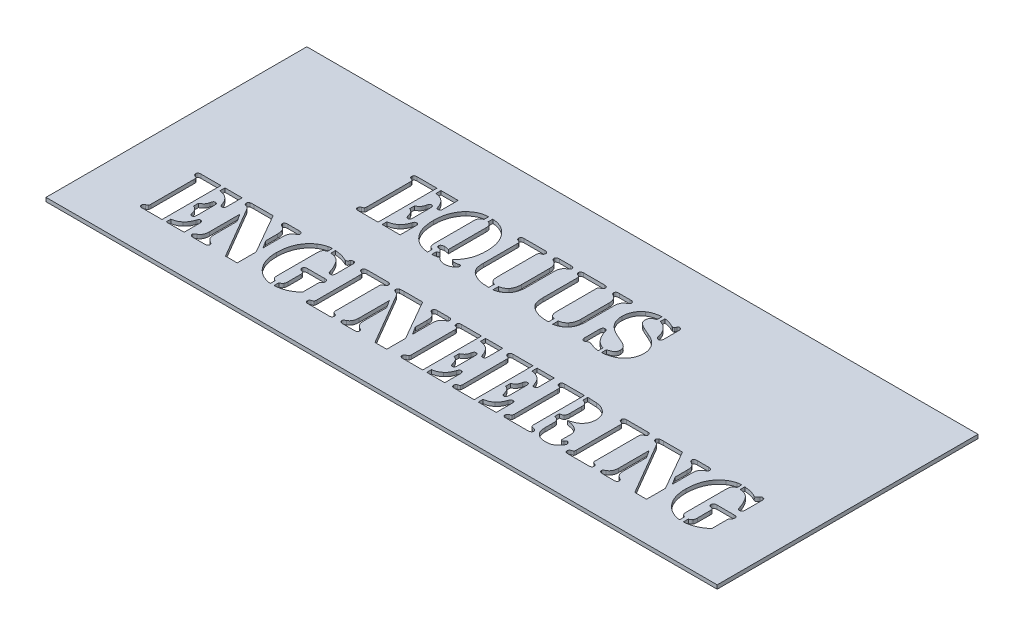
from build123d import *

# Parameters (mm, degrees)
SKETCH2_W           = 579.603712416
SKETCH2_H           = 225.234603271
BOSS_EXTRUDE1_DEPTH = 3.302


with BuildPart() as part:
    # Sketch2 → Boss-Extrude1 (new body)
    with BuildSketch(Plane(origin=(0, 0, 0), x_dir=(1, 0, 0), z_dir=(0, 1, 0))):
        with Locations((246.402789117, -12.217289918)):
            Rectangle(SKETCH2_W, SKETCH2_H)
        with BuildLine():
            Line((118.533333333, 50.8), (118.533333333, 0))
            Line((118.533333333, 0), (102.272482639, 0))
            Line((102.272482639, 0), (101.30234375, 0))
            add(Edge.make_bspline(
                [(101.30234375, 0), (101.110846282, 0.00633642), (100.751310871, 0.018233013), (100.242174062, 0.106342805), (99.797526982, 0.254515436), (99.427840895, 0.479301662), (99.124914844, 0.757781661), (98.932606358, 1.108569295), (98.799769502, 1.500969343), (98.785390151, 1.78100414), (98.777777778, 1.929253472)],
                knots=[0, 0, 0, 0, 1.275809178, 2.395324508, 3.433364274, 4.378530456, 5.262016052, 6.140052186, 7.015350866, 8, 8, 8, 8], degree=3))
            add(Edge.make_bspline(
                [(98.777777778, 1.929253472), (98.792776181, 2.163527033), (98.820987635, 2.604187118), (99.085635336, 3.205441921), (99.548133272, 3.664693472), (99.945811368, 3.834815349), (100.155815972, 3.924652778)],
                knots=[0, 0, 0, 0, 1.074896783, 2.021841926, 2.955380476, 4, 4, 4, 4], degree=3))
            add(Edge.make_bspline(
                [(100.155815972, 3.924652778), (100.328776901, 3.986402796), (100.630943976, 4.094281626), (101.022114038, 4.243599518), (101.296537702, 4.338896147), (101.518880043, 4.424535632), (101.721217574, 4.58630531), (101.826266874, 4.754210272), (101.886631944, 4.850694444)],
                knots=[0, 0, 0, 0, 1.641128884, 2.867093284, 3.73955991, 4.239698614, 4.988468111, 6, 6, 6, 6], degree=3))
            add(Edge.make_bspline(
                [(101.886631944, 4.850694444), (101.954192241, 4.962305088), (102.099725433, 5.202728149), (102.22004275, 5.641776749), (102.2992356, 6.15951961), (102.303334468, 6.533304707), (102.305555556, 6.735850694)],
                knots=[0, 0, 0, 0, 0.795728394, 1.714096871, 2.761318972, 4, 4, 4, 4], degree=3))
            Line((102.305555556, 6.735850694), (102.305555556, 43.931857639))
            add(Edge.make_bspline(
                [(102.305555556, 43.931857639), (102.302862745, 44.137978037), (102.297838882, 44.522528121), (102.223249331, 45.05233256), (102.097064883, 45.500306777), (101.953946913, 45.74569414), (101.886631944, 45.861111111)],
                knots=[0, 0, 0, 0, 1.234380862, 2.302932019, 3.201790819, 4, 4, 4, 4], degree=3))
            add(Edge.make_bspline(
                [(101.886631944, 45.861111111), (101.826234725, 45.95751051), (101.721129477, 46.125267945), (101.519095176, 46.287837201), (101.294635983, 46.371588679), (101.025356405, 46.484089278), (100.63014424, 46.626442765), (100.328485773, 46.73566061), (100.155815972, 46.798177083)],
                knots=[0, 0, 0, 0, 1.009569614, 1.75688657, 2.256055053, 3.138468602, 4.362054748, 6, 6, 6, 6], degree=3))
            add(Edge.make_bspline(
                [(100.155815972, 46.798177083), (99.944613436, 46.886836463), (99.539766782, 47.056784483), (99.088703936, 47.540730298), (98.820393793, 48.151380753), (98.79256695, 48.59950721), (98.777777778, 48.837673611)],
                knots=[0, 0, 0, 0, 1.03007389, 1.974512116, 2.923511095, 4, 4, 4, 4], degree=3))
            add(Edge.make_bspline(
                [(98.777777778, 48.837673611), (98.785568288, 48.989488076), (98.80029701, 49.276508167), (98.929983188, 49.677643624), (99.125227692, 50.030917885), (99.42749022, 50.310469166), (99.799808101, 50.531856565), (100.239546855, 50.697248237), (100.751726493, 50.780628706), (101.110990721, 50.793267999), (101.30234375, 50.8)],
                knots=[0, 0, 0, 0, 1.002003185, 1.894384998, 2.766311233, 3.643649008, 4.582238159, 5.621343591, 6.733068665, 8, 8, 8, 8], degree=3))
            Line((101.30234375, 50.8), (102.272482639, 50.8))
            Line((102.272482639, 50.8), (118.533333333, 50.8))
        make_face(mode=Mode.SUBTRACT)
        with BuildLine():
            Line((122.061111111, 50.8), (136.877777778, 50.8))
            Line((136.877777778, 50.8), (136.877777778, 37.427517361))
            add(Edge.make_bspline(
                [(136.877777778, 37.427517361), (136.877053802, 37.250416438), (136.8757151, 36.922939149), (136.778287227, 36.472814773), (136.657399531, 36.087140874), (136.453147737, 35.780284893), (136.187052801, 35.546316316), (135.85639685, 35.397137496), (135.469478655, 35.291001863), (135.188269614, 35.282408802), (135.03671875, 35.277777778)],
                knots=[0, 0, 0, 0, 1.297100046, 2.398467488, 3.37194797, 4.248080405, 5.071011418, 5.940462097, 6.890061477, 8, 8, 8, 8], degree=3))
            add(Edge.make_bspline(
                [(135.03671875, 35.277777778), (134.80429128, 35.292076001), (134.391818827, 35.317450037), (133.896239618, 35.52367569), (133.66468194, 35.845055908), (133.483471495, 36.148561893), (133.313354156, 36.542485864), (133.215209734, 36.83872981), (133.162586806, 36.997569444)],
                knots=[0, 0, 0, 0, 1.496408907, 2.655570162, 3.259085196, 3.998612629, 4.926899124, 6, 6, 6, 6], degree=3))
            add(Edge.make_bspline(
                [(133.162586806, 36.997569444), (132.918259646, 37.687890247), (132.44941885, 39.012550821), (131.504170486, 40.823851865), (130.388672951, 42.37219084), (129.095875775, 43.670850069), (127.622175712, 44.723213135), (125.944415684, 45.519220341), (124.077260844, 46.102382521), (122.748597721, 46.284843286), (122.061111111, 46.379253472)],
                knots=[0, 0, 0, 0, 1.130832012, 2.169960077, 3.145894403, 4.069657363, 4.990096479, 5.930045021, 6.928948727, 8, 8, 8, 8], degree=3))
            Line((122.061111111, 46.379253472), (122.061111111, 50.8))
        make_face(mode=Mode.SUBTRACT)
        with BuildLine():
            Line((122.061111111, 23.580989583), (122.061111111, 27.869444444))
            add(Edge.make_bspline(
                [(122.061111111, 27.869444444), (122.386391938, 28.045887495), (123.008169877, 28.38316036), (123.866074619, 28.921313101), (124.565612996, 29.518711713), (125.163791046, 30.130766999), (125.635541104, 30.835432359), (126.044618061, 31.616633525), (126.374200451, 32.507391424), (126.532168507, 33.140978508), (126.614149306, 33.469791667)],
                knots=[0, 0, 0, 0, 1.180986571, 2.257469038, 3.222785507, 4.110265038, 4.978639913, 5.917385587, 6.919184056, 8, 8, 8, 8], degree=3))
            add(Edge.make_bspline(
                [(126.614149306, 33.469791667), (126.661349803, 33.691397021), (126.748039583, 34.098403739), (126.927960202, 34.647462003), (127.115717753, 35.090729224), (127.345885995, 35.43460463), (127.619927237, 35.68418435), (127.934161804, 35.867055769), (128.302342362, 35.96692308), (128.561185209, 35.977665794), (128.697743056, 35.983333333)],
                knots=[0, 0, 0, 0, 1.505392146, 2.764846178, 3.836585285, 4.697326174, 5.492824879, 6.280783141, 7.092991927, 8, 8, 8, 8], degree=3))
            add(Edge.make_bspline(
                [(128.697743056, 35.983333333), (128.876290513, 35.976300119), (129.215637549, 35.962932802), (129.673202405, 35.765596206), (130.041496078, 35.449664), (130.194373646, 35.170185277), (130.27421875, 35.02421875)],
                knots=[0, 0, 0, 0, 1.085852217, 2.06376913, 2.988742716, 4, 4, 4, 4], degree=3))
            add(Edge.make_bspline(
                [(130.27421875, 35.02421875), (130.314752312, 34.914934538), (130.41239362, 34.65167977), (130.468381498, 34.157792902), (130.531981924, 33.515644633), (130.529280658, 33.032846435), (130.527777778, 32.764236111)],
                knots=[0, 0, 0, 0, 0.609895254, 1.469176849, 2.591947466, 4, 4, 4, 4], degree=3))
            Line((130.527777778, 32.764236111), (130.527777778, 18.664149306))
            add(Edge.make_bspline(
                [(130.527777778, 18.664149306), (130.523894385, 18.392150786), (130.516743333, 17.891280551), (130.458403861, 17.203219881), (130.341712871, 16.650758439), (130.181796326, 16.214502754), (129.937714181, 15.897024346), (129.619088044, 15.675484768), (129.222096377, 15.542602318), (128.930347902, 15.529306062), (128.774913194, 15.522222222)],
                knots=[0, 0, 0, 0, 1.58411055, 2.917051989, 4.012593196, 4.866950163, 5.598911493, 6.305405458, 7.097171608, 8, 8, 8, 8], degree=3))
            add(Edge.make_bspline(
                [(128.774913194, 15.522222222), (128.522467038, 15.544086471), (128.040612071, 15.585819713), (127.517358506, 15.945969506), (127.234071742, 16.362778162), (127.039940361, 16.761958576), (126.859985116, 17.244946014), (126.771935813, 17.600982363), (126.724392361, 17.793229167)],
                knots=[0, 0, 0, 0, 1.342036637, 2.56160375, 3.240040044, 4.033620071, 4.938225671, 6, 6, 6, 6], degree=3))
            add(Edge.make_bspline(
                [(126.724392361, 17.793229167), (126.62290412, 18.200163685), (126.42900712, 18.977626981), (126.015502702, 20.044741052), (125.562040469, 20.977348809), (125.012296915, 21.749950983), (124.394831296, 22.392203967), (123.703877629, 22.920784513), (122.918618028, 23.324918265), (122.351066474, 23.494402233), (122.061111111, 23.580989583)],
                knots=[0, 0, 0, 0, 1.278531199, 2.442680666, 3.485773606, 4.434753066, 5.322955403, 6.195374153, 7.078038041, 8, 8, 8, 8], degree=3))
        make_face(mode=Mode.SUBTRACT)
        with BuildLine():
            Line((122.061111111, 0), (122.061111111, 4.101041667))
            add(Edge.make_bspline(
                [(122.061111111, 4.101041667), (122.447543961, 4.167579179), (123.190653163, 4.295530615), (124.249847439, 4.531874811), (125.200947223, 4.823465631), (126.075642399, 5.139056329), (126.883059196, 5.5544714), (127.686590161, 6.030226491), (128.48459324, 6.601009795), (128.998277949, 7.033602137), (129.259982639, 7.253993056)],
                knots=[0, 0, 0, 0, 1.178424117, 2.266106011, 3.258322885, 4.167001624, 5.056005255, 5.982165939, 6.971982955, 8, 8, 8, 8], degree=3))
            add(Edge.make_bspline(
                [(129.259982639, 7.253993056), (129.756543618, 7.717396805), (130.704583107, 8.60213216), (131.676766923, 9.896343138), (132.316741879, 10.999749192), (132.766788448, 11.939851464), (133.219509563, 12.989042885), (133.486734045, 13.741905424), (133.625607639, 14.133159722)],
                knots=[0, 0, 0, 0, 1.478913818, 2.823557948, 3.509390326, 4.258413643, 5.094916917, 6, 6, 6, 6], degree=3))
            add(Edge.make_bspline(
                [(133.625607639, 14.133159722), (133.693137265, 14.321410736), (133.817864948, 14.669111655), (134.022919097, 15.138419175), (134.242501965, 15.504863996), (134.534929268, 15.872202201), (135.034888985, 16.177232279), (135.48395951, 16.210352486), (135.720225694, 16.227777778)],
                knots=[0, 0, 0, 0, 1.119865357, 2.068399023, 2.86239926, 3.505232302, 4.687446157, 6, 6, 6, 6], degree=3))
            add(Edge.make_bspline(
                [(135.720225694, 16.227777778), (135.882305459, 16.218169954), (136.184989907, 16.200227315), (136.607120356, 16.099558108), (136.942354474, 15.890903541), (137.201736934, 15.597022255), (137.372255957, 15.199604219), (137.504320146, 14.706748758), (137.575118798, 14.09834188), (137.580453643, 13.655578586), (137.583333333, 13.416579861)],
                knots=[0, 0, 0, 0, 0.999578033, 1.866714988, 2.638932701, 3.392362113, 4.242509345, 5.27434009, 6.528718957, 8, 8, 8, 8], degree=3))
            Line((137.583333333, 13.416579861), (137.583333333, 0))
            Line((137.583333333, 0), (122.061111111, 0))
        make_face(mode=Mode.SUBTRACT)
        with BuildLine():
            add(Edge.make_bspline(
                [(178.670920139, 4.222309028), (178.904011767, 4.0033505), (179.367141597, 3.568301732), (180.237395367, 3.145932876), (181.192578184, 2.865393827), (181.869408895, 2.836974485), (182.220746528, 2.822222222)],
                knots=[0, 0, 0, 0, 0.973532166, 1.934311371, 2.927716871, 4, 4, 4, 4], degree=3))
            add(Edge.make_bspline(
                [(182.220746528, 2.822222222), (182.624429681, 2.837134701), (183.402339976, 2.865871524), (184.145343256, 3.096922072), (184.502777778, 3.208072917)],
                knots=[0, 0, 0, 0, 1.037865562, 2, 2, 2, 2], degree=3))
            add(Edge.make_bspline(
                [(184.502777778, 3.208072917), (184.641907752, 3.257396937), (184.896193218, 3.347545603), (185.249169447, 3.44904718), (185.53370076, 3.506510692), (185.70061324, 3.52149659), (185.770572917, 3.527777778)],
                knots=[0, 0, 0, 0, 1.350158125, 2.467660846, 3.357735552, 4, 4, 4, 4], degree=3))
            add(Edge.make_bspline(
                [(185.770572917, 3.527777778), (185.921763999, 3.501767834), (186.257636263, 3.443986523), (186.607753558, 3.011027428), (186.914675776, 2.521032244), (186.953153185, 2.125349885), (186.972222222, 1.929253472)],
                knots=[0, 0, 0, 0, 0.824848819, 1.832408598, 2.925762324, 4, 4, 4, 4], degree=3))
            add(Edge.make_bspline(
                [(186.972222222, 1.929253472), (186.949157843, 1.722817912), (186.900244891, 1.285027118), (186.51586602, 0.660460506), (185.964161891, 0.018070369), (185.474248435, -0.358075321), (185.208333333, -0.562239583)],
                knots=[0, 0, 0, 0, 0.781746762, 1.657861349, 2.728734577, 4, 4, 4, 4], degree=3))
            add(Edge.make_bspline(
                [(185.208333333, -0.562239583), (184.688696997, -0.909790847), (183.681249844, -1.583607334), (182.045595972, -2.293851855), (180.38823442, -2.734801765), (179.268824288, -2.79328751), (178.715017361, -2.822222222)],
                knots=[0, 0, 0, 0, 1.072120022, 2.078577247, 3.049412543, 4, 4, 4, 4], degree=3))
            add(Edge.make_bspline(
                [(178.715017361, -2.822222222), (178.357978535, -2.815300402), (177.659231323, -2.801753968), (176.641246043, -2.650368892), (175.673749172, -2.426137045), (174.770095527, -2.08642718), (173.906247519, -1.684366363), (173.115659526, -1.160238926), (172.377997433, -0.547958079), (171.937807721, -0.081967815), (171.714583333, 0.154340278)],
                knots=[0, 0, 0, 0, 1.090009716, 2.133216879, 3.138077779, 4.118427735, 5.077588972, 6.042972852, 7.00757293, 8, 8, 8, 8], degree=3))
            add(Edge.make_bspline(
                [(171.714583333, 0.154340278), (171.279165233, 0.01183783), (170.384398024, -0.280999142), (168.956916859, -0.607396564), (167.420639595, -0.85702842), (166.353774803, -0.968156256), (165.805555556, -1.025260417)],
                knots=[0, 0, 0, 0, 0.909744662, 1.869489791, 2.905215813, 4, 4, 4, 4], degree=3))
            Line((165.805555556, -1.025260417), (165.805555556, 3.07578125))
            add(Edge.make_bspline(
                [(165.805555556, 3.07578125), (166.045556321, 3.133168787), (166.462009157, 3.232748481), (167.026621136, 3.435015468), (167.48770191, 3.750799766), (167.760629239, 4.004936575), (167.911197917, 4.145138889)],
                knots=[0, 0, 0, 0, 1.232538078, 2.138718095, 2.973167123, 4, 4, 4, 4], degree=3))
            Line((167.911197917, 4.145138889), (167.624565972, 4.431770833))
            add(Edge.make_bspline(
                [(167.624565972, 4.431770833), (167.471460459, 4.612892333), (167.185735156, 4.950901034), (166.771340302, 5.404608632), (166.394486381, 5.761228944), (165.952659029, 6.120348598), (165.361390427, 6.461058319), (164.840229472, 6.576802165), (164.570833333, 6.636631944)],
                knots=[0, 0, 0, 0, 1.105999587, 2.064014948, 2.864172868, 3.522574109, 4.719380335, 6, 6, 6, 6], degree=3))
            add(Edge.make_bspline(
                [(164.570833333, 6.636631944), (164.401735885, 6.669290483), (164.096071641, 6.72832477), (163.690537991, 6.812192629), (163.386565169, 6.893420102), (163.110948563, 6.968045212), (162.84976781, 7.136782721), (162.713144364, 7.322222653), (162.641579861, 7.419357639)],
                knots=[0, 0, 0, 0, 1.443138473, 2.608648654, 3.467430342, 4.080893138, 4.994755794, 6, 6, 6, 6], degree=3))
            add(Edge.make_bspline(
                [(162.641579861, 7.419357639), (162.534103414, 7.571805406), (162.317213074, 7.879449069), (162.291000926, 8.255109822), (162.277777778, 8.444618056)],
                knots=[0, 0, 0, 0, 0.991067171, 2, 2, 2, 2], degree=3))
            add(Edge.make_bspline(
                [(162.277777778, 8.444618056), (162.287212219, 8.604437257), (162.305550134, 8.915081109), (162.483235771, 9.346003878), (162.755665702, 9.72907907), (163.15457676, 10.028835576), (163.627834713, 10.286815173), (164.187326242, 10.454344456), (164.815811963, 10.571457608), (165.261038948, 10.57922105), (165.496875, 10.583333333)],
                knots=[0, 0, 0, 0, 0.883491014, 1.717259568, 2.550028399, 3.464788707, 4.46001827, 5.531431365, 6.692402974, 8, 8, 8, 8], degree=3))
            add(Edge.make_bspline(
                [(165.496875, 10.583333333), (165.864753489, 10.575444128), (166.547684311, 10.560798582), (167.527737658, 10.437998193), (168.446875372, 10.211452133), (169.03086241, 9.977106444), (169.333333333, 9.855729167)],
                knots=[0, 0, 0, 0, 1.121812024, 2.08253548, 3.006866204, 4, 4, 4, 4], degree=3))
            Line((169.333333333, 9.855729167), (169.333333333, 42.454600694))
            add(Edge.make_bspline(
                [(169.333333333, 42.454600694), (169.324774072, 42.771093479), (169.308481843, 43.373525529), (169.190168017, 44.224806988), (168.989949116, 44.980431761), (168.7674049, 45.419415306), (168.660850694, 45.629600694)],
                knots=[0, 0, 0, 0, 1.157578965, 2.203407792, 3.139791374, 4, 4, 4, 4], degree=3))
            add(Edge.make_bspline(
                [(168.660850694, 45.629600694), (168.505254966, 45.872298814), (168.207562419, 46.336639461), (167.589153365, 46.919724846), (166.774940666, 47.374320904), (166.154857441, 47.61224261), (165.805555556, 47.746267361)],
                knots=[0, 0, 0, 0, 0.947326719, 1.812466874, 2.767730825, 4, 4, 4, 4], degree=3))
            Line((165.805555556, 47.746267361), (165.805555556, 51.803211806))
            add(Edge.make_bspline(
                [(165.805555556, 51.803211806), (166.464737666, 51.756489105), (167.757107453, 51.664886185), (169.644898967, 51.323448676), (171.449930198, 50.846523502), (173.169090802, 50.1837412), (174.826090633, 49.381233246), (176.405228422, 48.386189451), (177.937362654, 47.240866429), (178.88433091, 46.362499337), (179.365451389, 45.916232639)],
                knots=[0, 0, 0, 0, 1.047400079, 2.053496589, 3.037489644, 4.00408617, 4.9711043, 5.952764488, 6.959873338, 8, 8, 8, 8], degree=3))
            add(Edge.make_bspline(
                [(179.365451389, 45.916232639), (179.976607892, 45.279475859), (181.195065991, 44.009978683), (182.74300434, 41.856017733), (184.040357819, 39.526068342), (185.137661831, 37.033390175), (185.95503798, 34.344062017), (186.547760196, 31.484794853), (186.904521607, 28.444346289), (186.949251867, 26.360087509), (186.972222222, 25.289756944)],
                knots=[0, 0, 0, 0, 0.93651806, 1.867128973, 2.807308, 3.765184575, 4.754049634, 5.786683681, 6.863394446, 8, 8, 8, 8], degree=3))
            add(Edge.make_bspline(
                [(186.972222222, 25.289756944), (186.947109465, 24.189872602), (186.898149239, 22.045520772), (186.50918591, 18.922147705), (185.860194678, 15.987186412), (184.960962119, 13.23689282), (183.786085592, 10.679248088), (182.340111707, 8.321280516), (180.657366785, 6.133691338), (179.334547869, 4.860859429), (178.670920139, 4.222309028)],
                knots=[0, 0, 0, 0, 1.13035531, 2.203758507, 3.229282274, 4.215960691, 5.172593439, 6.115199556, 7.054439104, 8, 8, 8, 8], degree=3))
        make_face(mode=Mode.SUBTRACT)
        with BuildLine():
            add(Edge.make_bspline(
                [(162.277777778, 47.746267361), (161.97676578, 47.628848212), (161.407144819, 47.406649733), (160.642989125, 46.97268089), (160.01883635, 46.476902385), (159.515768295, 45.909875585), (159.170135005, 45.220519771), (158.916744464, 44.421795955), (158.782889846, 43.480496858), (158.761439442, 42.811418404), (158.75, 42.454600694)],
                knots=[0, 0, 0, 0, 1.118377415, 2.116364868, 3.030964595, 3.870538326, 4.719041391, 5.681309848, 6.763448884, 8, 8, 8, 8], degree=3))
            Line((158.75, 42.454600694), (158.75, 9.260416667))
            add(Edge.make_bspline(
                [(158.75, 9.260416667), (158.75686037, 8.755967037), (158.769531047, 7.824280021), (158.950290214, 6.54798254), (159.202010012, 5.489775612), (159.521456471, 4.919545576), (159.665017361, 4.66328125)],
                knots=[0, 0, 0, 0, 1.27427824, 2.353512468, 3.260059993, 4, 4, 4, 4], degree=3))
            add(Edge.make_bspline(
                [(159.665017361, 4.66328125), (159.801060777, 4.487145485), (160.086891814, 4.117079296), (160.690246436, 3.681168708), (161.432937477, 3.328863173), (161.984626517, 3.163598184), (162.277777778, 3.07578125)],
                knots=[0, 0, 0, 0, 0.851726799, 1.789501929, 2.825406619, 4, 4, 4, 4], degree=3))
            Line((162.277777778, 3.07578125), (162.277777778, -0.9921875))
            add(Edge.make_bspline(
                [(162.277777778, -0.9921875), (161.599964216, -0.922947091), (160.261479464, -0.78621741), (158.307059365, -0.382499555), (156.43519674, 0.165663843), (154.653306497, 0.879337358), (152.947435495, 1.725310715), (151.332808363, 2.73576332), (149.798444218, 3.895713825), (148.860773259, 4.779246012), (148.387152778, 5.225520833)],
                knots=[0, 0, 0, 0, 1.051385509, 2.076180753, 3.076110661, 4.059092477, 5.035964268, 6.012044883, 6.995877765, 8, 8, 8, 8], degree=3))
            add(Edge.make_bspline(
                [(148.387152778, 5.225520833), (147.802441387, 5.844732778), (146.636760761, 7.079193707), (145.153555279, 9.167922716), (143.905760529, 11.431038509), (142.875329843, 13.86870114), (142.084255763, 16.49024279), (141.516305749, 19.283474827), (141.167206046, 22.256565872), (141.130151912, 24.296585186), (141.111111111, 25.344878472)],
                knots=[0, 0, 0, 0, 0.929101366, 1.852256478, 2.788058139, 3.746505495, 4.736611211, 5.773063896, 6.855656831, 8, 8, 8, 8], degree=3))
            add(Edge.make_bspline(
                [(141.111111111, 25.344878472), (141.133086353, 26.400674803), (141.176101588, 28.467333643), (141.550749547, 31.483750247), (142.138758179, 34.345590214), (142.975177953, 37.043350201), (144.05232703, 39.567308365), (145.378903625, 41.891927651), (146.898939958, 44.052202436), (148.119590413, 45.302928282), (148.72890625, 45.927256944)],
                knots=[0, 0, 0, 0, 1.123125173, 2.198451065, 3.229210727, 4.228575418, 5.199030772, 6.142910105, 7.072990733, 8, 8, 8, 8], degree=3))
            add(Edge.make_bspline(
                [(148.72890625, 45.927256944), (149.210211913, 46.373215685), (150.157544659, 47.250976639), (151.685485156, 48.399533972), (153.269706114, 49.375933248), (154.915969358, 50.187628596), (156.630698601, 50.843556187), (158.433910294, 51.326886342), (160.322852826, 51.663500044), (161.618676384, 51.756108096), (162.277777778, 51.803211806)],
                knots=[0, 0, 0, 0, 1.041191674, 2.049331728, 3.02892685, 3.991699427, 4.959285675, 5.938654922, 6.951527461, 8, 8, 8, 8], degree=3))
            Line((162.277777778, 51.803211806), (162.277777778, 47.746267361))
        make_face(mode=Mode.SUBTRACT)
        with BuildLine():
            Line((194.733333333, 14.772569444), (194.733333333, 43.931857639))
            add(Edge.make_bspline(
                [(194.733333333, 43.931857639), (194.730640522, 44.137978037), (194.725616659, 44.522528121), (194.651027108, 45.05233256), (194.52484266, 45.500306777), (194.381724691, 45.74569414), (194.314409722, 45.861111111)],
                knots=[0, 0, 0, 0, 1.234380862, 2.302932019, 3.201790819, 4, 4, 4, 4], degree=3))
            add(Edge.make_bspline(
                [(194.314409722, 45.861111111), (194.254012502, 45.95751051), (194.148907255, 46.125267945), (193.946872954, 46.287837201), (193.72241376, 46.371588679), (193.453134183, 46.484089278), (193.057922018, 46.626442765), (192.75626355, 46.73566061), (192.58359375, 46.798177083)],
                knots=[0, 0, 0, 0, 1.009569614, 1.75688657, 2.256055053, 3.138468602, 4.362054748, 6, 6, 6, 6], degree=3))
            add(Edge.make_bspline(
                [(192.58359375, 46.798177083), (192.37292948, 46.887386393), (191.971573295, 47.057347385), (191.516684925, 47.528087746), (191.248129497, 48.129050693), (191.220333229, 48.570113193), (191.205555556, 48.804600694)],
                knots=[0, 0, 0, 0, 1.041483567, 1.98422766, 2.928330066, 4, 4, 4, 4], degree=3))
            add(Edge.make_bspline(
                [(191.205555556, 48.804600694), (191.213837411, 48.959789978), (191.229508555, 49.253443192), (191.35264193, 49.667565178), (191.569287914, 50.020405975), (191.873462058, 50.311886075), (192.259220017, 50.528314994), (192.706634717, 50.701301488), (193.231460349, 50.778989084), (193.601379266, 50.79275013), (193.796267361, 50.8)],
                knots=[0, 0, 0, 0, 1.002726072, 1.897384446, 2.761532256, 3.652394326, 4.589906903, 5.605228772, 6.738338646, 8, 8, 8, 8], degree=3))
            Line((193.796267361, 50.8), (194.700260417, 50.8))
            Line((194.700260417, 50.8), (210.994184028, 50.8))
            Line((210.994184028, 50.8), (211.964322917, 50.8))
            Line((211.964322917, 50.8), (213.309288194, 50.645659722))
            add(Edge.make_bspline(
                [(213.309288194, 50.645659722), (213.47514231, 50.568069072), (213.812730731, 50.410136873), (214.180411305, 49.966557551), (214.459940469, 49.425609851), (214.478944659, 49.010689655), (214.488888889, 48.793576389)],
                knots=[0, 0, 0, 0, 0.92965803, 1.892276139, 2.897101623, 4, 4, 4, 4], degree=3))
            add(Edge.make_bspline(
                [(214.488888889, 48.793576389), (214.473655365, 48.562846703), (214.44478872, 48.125627329), (214.177761241, 47.528093628), (213.722870667, 47.057345735), (213.321514798, 46.887385825), (213.110850694, 46.798177083)],
                knots=[0, 0, 0, 0, 1.059364441, 2.007434175, 2.954139888, 4, 4, 4, 4], degree=3))
            add(Edge.make_bspline(
                [(213.110850694, 46.798177083), (212.937439257, 46.73761747), (212.633236609, 46.631382294), (212.240864558, 46.468140679), (211.964304302, 46.362141151), (211.738302733, 46.278895611), (211.545894736, 46.109436575), (211.441127496, 45.945615538), (211.380034722, 45.850086806)],
                knots=[0, 0, 0, 0, 1.633395197, 2.865342401, 3.775729129, 4.273510971, 4.993234874, 6, 6, 6, 6], degree=3))
            add(Edge.make_bspline(
                [(211.380034722, 45.850086806), (211.311392904, 45.738776352), (211.164079057, 45.499890329), (211.062235903, 45.048666782), (210.962894396, 44.524284999), (210.961732809, 44.13839257), (210.961111111, 43.931857639)],
                knots=[0, 0, 0, 0, 0.783173522, 1.680787416, 2.758725557, 4, 4, 4, 4], degree=3))
            Line((210.961111111, 43.931857639), (210.961111111, 12.810243056))
            add(Edge.make_bspline(
                [(210.961111111, 12.810243056), (210.962091748, 12.321428346), (210.963883717, 11.4281919), (211.003332659, 10.204829389), (211.032855728, 9.221527265), (211.134502316, 8.246401958), (211.329603251, 7.221242375), (211.659524676, 6.503074576), (211.821006944, 6.1515625)],
                knots=[0, 0, 0, 0, 1.297880407, 2.371684116, 3.250791199, 3.908150793, 4.976130288, 6, 6, 6, 6], degree=3))
            add(Edge.make_bspline(
                [(211.821006944, 6.1515625), (211.978221604, 5.879412045), (212.266855602, 5.379764787), (212.774152376, 4.853918201), (213.290554591, 4.569309952), (213.797981052, 4.360267356), (214.430235851, 4.110139223), (214.902948351, 3.96170293), (215.161371528, 3.880555556)],
                knots=[0, 0, 0, 0, 1.349479507, 2.477540353, 3.078975584, 3.871221815, 4.836236359, 6, 6, 6, 6], degree=3))
            Line((215.161371528, 3.880555556), (215.161371528, -0.9921875))
            Line((215.161371528, -0.9921875), (214.345572917, -0.9921875))
            add(Edge.make_bspline(
                [(214.345572917, -0.9921875), (213.584556558, -0.981896604), (212.130663907, -0.962236241), (210.047465566, -0.806855392), (208.16070916, -0.561491197), (206.986825834, -0.277836723), (206.430121528, -0.143315972)],
                knots=[0, 0, 0, 0, 1.143959209, 2.185490323, 3.139484029, 4, 4, 4, 4], degree=3))
            add(Edge.make_bspline(
                [(206.430121528, -0.143315972), (205.827383126, 0.033167731), (204.645317526, 0.379280262), (202.965241568, 1.075960868), (201.38597494, 1.864679953), (199.944416604, 2.784295441), (198.655635762, 3.789534549), (197.5570481, 4.864064966), (196.635092564, 5.987653684), (196.194454004, 6.816029038), (195.979079861, 7.220920139)],
                knots=[0, 0, 0, 0, 1.145447734, 2.24640467, 3.314177613, 4.363509257, 5.361722521, 6.291268218, 7.164810629, 8, 8, 8, 8], degree=3))
            add(Edge.make_bspline(
                [(195.979079861, 7.220920139), (195.87977946, 7.447302422), (195.673053005, 7.918591623), (195.427607587, 8.680624864), (195.201148724, 9.513918222), (195.03006803, 10.424826993), (194.901939542, 11.407981931), (194.798843457, 12.462929334), (194.748619238, 13.59248154), (194.738522194, 14.371983938), (194.733333333, 14.772569444)],
                knots=[0, 0, 0, 0, 0.768921948, 1.600764009, 2.488515818, 3.455265764, 4.482371669, 5.573753861, 6.753154526, 8, 8, 8, 8], degree=3))
        make_face(mode=Mode.SUBTRACT)
        with BuildLine():
            Line((218.722222222, -0.9921875), (218.722222222, 3.847482639))
            add(Edge.make_bspline(
                [(218.722222222, 3.847482639), (219.286668156, 3.951811769), (220.39219375, 4.156151134), (221.937797331, 4.813744683), (223.360308149, 5.689994263), (224.145696735, 6.479649289), (224.543055556, 6.879166667)],
                knots=[0, 0, 0, 0, 1.02613662, 2.009794435, 2.993077124, 4, 4, 4, 4], degree=3))
            add(Edge.make_bspline(
                [(224.543055556, 6.879166667), (224.754571023, 7.132038897), (225.181436388, 7.642367519), (225.724468414, 8.49999621), (226.17197469, 9.443410562), (226.550846091, 10.46020705), (226.831780347, 11.55876759), (227.043401292, 12.729877114), (227.162429928, 13.983720485), (227.179882461, 14.845821961), (227.188888889, 15.290711806)],
                knots=[0, 0, 0, 0, 0.876697886, 1.769288871, 2.692224349, 3.651442817, 4.652475985, 5.70565652, 6.815997718, 8, 8, 8, 8], degree=3))
            Line((227.188888889, 15.290711806), (227.188888889, 39.467013889))
            add(Edge.make_bspline(
                [(227.188888889, 39.467013889), (227.181327669, 39.883144754), (227.166721986, 40.686966903), (226.969768352, 41.839796978), (226.678848361, 42.898283707), (226.25839762, 43.858856731), (225.707696358, 44.714467209), (225.05756807, 45.49039577), (224.260364435, 46.143660009), (223.666010926, 46.49702767), (223.363454861, 46.676909722)],
                knots=[0, 0, 0, 0, 1.158086529, 2.237026091, 3.248207816, 4.210847961, 5.145307146, 6.074817308, 7.019984419, 8, 8, 8, 8], degree=3))
            add(Edge.make_bspline(
                [(223.363454861, 46.676909722), (223.189621041, 46.774182262), (222.874348546, 46.950599927), (222.453139905, 47.221446804), (222.129634613, 47.464685577), (221.804449338, 47.769044974), (221.581773855, 48.296515435), (221.557765889, 48.743816977), (221.544444444, 48.992013889)],
                knots=[0, 0, 0, 0, 1.137143506, 2.062372392, 2.855431385, 3.448813392, 4.584407656, 6, 6, 6, 6], degree=3))
            add(Edge.make_bspline(
                [(221.544444444, 48.992013889), (221.552191715, 49.143504229), (221.566897388, 49.431059355), (221.696963046, 49.834417948), (221.942698248, 50.151748974), (222.270402569, 50.408906129), (222.703665097, 50.590892628), (223.239422585, 50.718133884), (223.886898876, 50.792720427), (224.355434602, 50.797442465), (224.609201389, 50.8)],
                knots=[0, 0, 0, 0, 0.897096013, 1.702844927, 2.465039847, 3.240496688, 4.147058219, 5.22452456, 6.496756074, 8, 8, 8, 8], degree=3))
            Line((224.609201389, 50.8), (233.836545139, 50.8))
            add(Edge.make_bspline(
                [(233.836545139, 50.8), (234.009248376, 50.800682035), (234.325305656, 50.8019302), (234.751991314, 50.794366615), (235.086120031, 50.76853078), (235.409785659, 50.746853915), (235.754862471, 50.661730912), (235.988942135, 50.526678575), (236.107552083, 50.458246528)],
                knots=[0, 0, 0, 0, 1.333773652, 2.440885764, 3.294120428, 3.921014534, 4.946562232, 6, 6, 6, 6], degree=3))
            add(Edge.make_bspline(
                [(236.107552083, 50.458246528), (236.252892384, 50.3620575), (236.527152424, 50.180546889), (236.840259741, 49.809108062), (237.0415435, 49.381869718), (237.058248008, 49.071342026), (237.066666667, 48.91484375)],
                knots=[0, 0, 0, 0, 1.091391213, 2.059476941, 3.022024376, 4, 4, 4, 4], degree=3))
            add(Edge.make_bspline(
                [(237.066666667, 48.91484375), (237.061155034, 48.78179234), (237.050236233, 48.518211318), (236.937879682, 48.140884734), (236.74574246, 47.797014504), (236.564224807, 47.61029105), (236.471354167, 47.514756944)],
                knots=[0, 0, 0, 0, 1.016371757, 2.013479646, 2.983628243, 4, 4, 4, 4], degree=3))
            add(Edge.make_bspline(
                [(236.471354167, 47.514756944), (236.416758602, 47.469957478), (236.262040911, 47.343000828), (235.941121112, 47.132036327), (235.474727288, 46.828076075), (235.105556766, 46.612513699), (234.894878472, 46.489496528)],
                knots=[0, 0, 0, 0, 0.450033346, 1.275343907, 2.445092823, 4, 4, 4, 4], degree=3))
            add(Edge.make_bspline(
                [(234.894878472, 46.489496528), (234.63080018, 46.329662965), (234.099054597, 46.007823597), (233.419662986, 45.350664168), (232.811127824, 44.591904508), (232.315445899, 43.714052954), (231.914738087, 42.747786893), (231.634450998, 41.710001402), (231.448447245, 40.609163295), (231.431099992, 39.85365756), (231.422222222, 39.467013889)],
                knots=[0, 0, 0, 0, 0.899617234, 1.811460858, 2.744067812, 3.735198226, 4.746433817, 5.793921433, 6.870999549, 8, 8, 8, 8], degree=3))
            Line((231.422222222, 39.467013889), (231.422222222, 15.257638889))
            add(Edge.make_bspline(
                [(231.422222222, 15.257638889), (231.413253528, 14.750278261), (231.395744699, 13.759800639), (231.273464074, 12.305124892), (231.068460675, 10.919297434), (230.768972894, 9.604979723), (230.393476968, 8.35823616), (229.933709257, 7.179974963), (229.381697702, 6.07015219), (228.947538809, 5.380181208), (228.732291667, 5.038107639)],
                knots=[0, 0, 0, 0, 1.135464037, 2.216671254, 3.264679816, 4.268276654, 5.230935086, 6.176328675, 7.095860875, 8, 8, 8, 8], degree=3))
            add(Edge.make_bspline(
                [(228.732291667, 5.038107639), (228.38194867, 4.559895168), (227.674637324, 3.594426728), (226.344111679, 2.336004338), (224.818647056, 1.207817378), (223.674013664, 0.613189385), (223.087847222, 0.308680556)],
                knots=[0, 0, 0, 0, 0.953383016, 1.9247955, 2.937288351, 4, 4, 4, 4], degree=3))
            add(Edge.make_bspline(
                [(223.087847222, 0.308680556), (222.770488606, 0.163209995), (222.121194211, -0.134412993), (221.066957917, -0.482980018), (219.929657518, -0.781707434), (219.131366293, -0.920865524), (218.722222222, -0.9921875)],
                knots=[0, 0, 0, 0, 0.915823789, 1.873713905, 2.910225592, 4, 4, 4, 4], degree=3))
        make_face(mode=Mode.SUBTRACT)
        with BuildLine():
            Line((246.238888889, 14.772569444), (246.238888889, 43.931857639))
            add(Edge.make_bspline(
                [(246.238888889, 43.931857639), (246.236196078, 44.137978037), (246.231172215, 44.522528121), (246.156582664, 45.05233256), (246.030398216, 45.500306777), (245.887280246, 45.74569414), (245.819965278, 45.861111111)],
                knots=[0, 0, 0, 0, 1.234380862, 2.302932019, 3.201790819, 4, 4, 4, 4], degree=3))
            add(Edge.make_bspline(
                [(245.819965278, 45.861111111), (245.759568058, 45.95751051), (245.65446281, 46.125267945), (245.452428509, 46.287837201), (245.227969316, 46.371588679), (244.958689738, 46.484089278), (244.563477574, 46.626442765), (244.261819106, 46.73566061), (244.089149306, 46.798177083)],
                knots=[0, 0, 0, 0, 1.009569614, 1.75688657, 2.256055053, 3.138468602, 4.362054748, 6, 6, 6, 6], degree=3))
            add(Edge.make_bspline(
                [(244.089149306, 46.798177083), (243.878485035, 46.887386393), (243.47712885, 47.057347385), (243.02224048, 47.528087746), (242.753685053, 48.129050693), (242.725888784, 48.570113193), (242.711111111, 48.804600694)],
                knots=[0, 0, 0, 0, 1.041483567, 1.98422766, 2.928330066, 4, 4, 4, 4], degree=3))
            add(Edge.make_bspline(
                [(242.711111111, 48.804600694), (242.719392967, 48.959789978), (242.73506411, 49.253443192), (242.858197486, 49.667565178), (243.074843469, 50.020405975), (243.379017614, 50.311886075), (243.764775572, 50.528314994), (244.212190272, 50.701301488), (244.737015905, 50.778989084), (245.106934822, 50.79275013), (245.301822917, 50.8)],
                knots=[0, 0, 0, 0, 1.002726072, 1.897384446, 2.761532256, 3.652394326, 4.589906903, 5.605228772, 6.738338646, 8, 8, 8, 8], degree=3))
            Line((245.301822917, 50.8), (246.205815972, 50.8))
            Line((246.205815972, 50.8), (262.499739583, 50.8))
            Line((262.499739583, 50.8), (263.469878472, 50.8))
            Line((263.469878472, 50.8), (264.81484375, 50.645659722))
            add(Edge.make_bspline(
                [(264.81484375, 50.645659722), (264.980697866, 50.568069072), (265.318286287, 50.410136873), (265.68596686, 49.966557551), (265.965496025, 49.425609851), (265.984500215, 49.010689655), (265.994444444, 48.793576389)],
                knots=[0, 0, 0, 0, 0.92965803, 1.892276139, 2.897101623, 4, 4, 4, 4], degree=3))
            add(Edge.make_bspline(
                [(265.994444444, 48.793576389), (265.97921092, 48.562846703), (265.950344275, 48.125627329), (265.683316797, 47.528093628), (265.228426222, 47.057345735), (264.827070354, 46.887385825), (264.61640625, 46.798177083)],
                knots=[0, 0, 0, 0, 1.059364441, 2.007434175, 2.954139888, 4, 4, 4, 4], degree=3))
            add(Edge.make_bspline(
                [(264.61640625, 46.798177083), (264.442994813, 46.73761747), (264.138792164, 46.631382294), (263.746420114, 46.468140679), (263.469859858, 46.362141151), (263.243858289, 46.278895611), (263.051450292, 46.109436575), (262.946683052, 45.945615538), (262.885590278, 45.850086806)],
                knots=[0, 0, 0, 0, 1.633395197, 2.865342401, 3.775729129, 4.273510971, 4.993234874, 6, 6, 6, 6], degree=3))
            add(Edge.make_bspline(
                [(262.885590278, 45.850086806), (262.816948459, 45.738776352), (262.669634612, 45.499890329), (262.567791459, 45.048666782), (262.468449952, 44.524284999), (262.467288364, 44.13839257), (262.466666667, 43.931857639)],
                knots=[0, 0, 0, 0, 0.783173522, 1.680787416, 2.758725557, 4, 4, 4, 4], degree=3))
            Line((262.466666667, 43.931857639), (262.466666667, 12.810243056))
            add(Edge.make_bspline(
                [(262.466666667, 12.810243056), (262.467647304, 12.321428346), (262.469439273, 11.4281919), (262.508888215, 10.204829389), (262.538411284, 9.221527265), (262.640057871, 8.246401958), (262.835158806, 7.221242375), (263.165080232, 6.503074576), (263.3265625, 6.1515625)],
                knots=[0, 0, 0, 0, 1.297880407, 2.371684116, 3.250791199, 3.908150793, 4.976130288, 6, 6, 6, 6], degree=3))
            add(Edge.make_bspline(
                [(263.3265625, 6.1515625), (263.48377716, 5.879412045), (263.772411157, 5.379764787), (264.279707931, 4.853918201), (264.796110147, 4.569309952), (265.303536607, 4.360267356), (265.935791407, 4.110139223), (266.408503907, 3.96170293), (266.666927083, 3.880555556)],
                knots=[0, 0, 0, 0, 1.349479507, 2.477540353, 3.078975584, 3.871221815, 4.836236359, 6, 6, 6, 6], degree=3))
            Line((266.666927083, 3.880555556), (266.666927083, -0.9921875))
            Line((266.666927083, -0.9921875), (265.851128472, -0.9921875))
            add(Edge.make_bspline(
                [(265.851128472, -0.9921875), (265.090112114, -0.981896604), (263.636219462, -0.962236241), (261.553021121, -0.806855392), (259.666264715, -0.561491197), (258.492381389, -0.277836723), (257.935677083, -0.143315972)],
                knots=[0, 0, 0, 0, 1.143959209, 2.185490323, 3.139484029, 4, 4, 4, 4], degree=3))
            add(Edge.make_bspline(
                [(257.935677083, -0.143315972), (257.332938681, 0.033167731), (256.150873082, 0.379280262), (254.470797123, 1.075960868), (252.891530496, 1.864679953), (251.449972159, 2.784295441), (250.161191318, 3.789534549), (249.062603655, 4.864064966), (248.14064812, 5.987653684), (247.700009559, 6.816029038), (247.484635417, 7.220920139)],
                knots=[0, 0, 0, 0, 1.145447734, 2.24640467, 3.314177613, 4.363509257, 5.361722521, 6.291268218, 7.164810629, 8, 8, 8, 8], degree=3))
            add(Edge.make_bspline(
                [(247.484635417, 7.220920139), (247.385335015, 7.447302422), (247.178608561, 7.918591623), (246.933163142, 8.680624864), (246.70670428, 9.513918222), (246.535623585, 10.424826993), (246.407495097, 11.407981931), (246.304399013, 12.462929334), (246.254174793, 13.59248154), (246.24407775, 14.371983938), (246.238888889, 14.772569444)],
                knots=[0, 0, 0, 0, 0.768921948, 1.600764009, 2.488515818, 3.455265764, 4.482371669, 5.573753861, 6.753154526, 8, 8, 8, 8], degree=3))
        make_face(mode=Mode.SUBTRACT)
        with BuildLine():
            Line((270.227777778, -0.9921875), (270.227777778, 3.847482639))
            add(Edge.make_bspline(
                [(270.227777778, 3.847482639), (270.792223712, 3.951811769), (271.897749306, 4.156151134), (273.443352886, 4.813744683), (274.865863704, 5.689994263), (275.651252291, 6.479649289), (276.048611111, 6.879166667)],
                knots=[0, 0, 0, 0, 1.02613662, 2.009794435, 2.993077124, 4, 4, 4, 4], degree=3))
            add(Edge.make_bspline(
                [(276.048611111, 6.879166667), (276.260126579, 7.132038897), (276.686991944, 7.642367519), (277.23002397, 8.49999621), (277.677530246, 9.443410562), (278.056401647, 10.46020705), (278.337335903, 11.55876759), (278.548956848, 12.729877114), (278.667985484, 13.983720485), (278.685438017, 14.845821961), (278.694444444, 15.290711806)],
                knots=[0, 0, 0, 0, 0.876697886, 1.769288871, 2.692224349, 3.651442817, 4.652475985, 5.70565652, 6.815997718, 8, 8, 8, 8], degree=3))
            Line((278.694444444, 15.290711806), (278.694444444, 39.467013889))
            add(Edge.make_bspline(
                [(278.694444444, 39.467013889), (278.686883225, 39.883144754), (278.672277541, 40.686966903), (278.475323908, 41.839796978), (278.184403917, 42.898283707), (277.763953175, 43.858856731), (277.213251913, 44.714467209), (276.563123626, 45.49039577), (275.765919991, 46.143660009), (275.171566481, 46.49702767), (274.869010417, 46.676909722)],
                knots=[0, 0, 0, 0, 1.158086529, 2.237026091, 3.248207816, 4.210847961, 5.145307146, 6.074817308, 7.019984419, 8, 8, 8, 8], degree=3))
            add(Edge.make_bspline(
                [(274.869010417, 46.676909722), (274.695176597, 46.774182262), (274.379904102, 46.950599927), (273.958695461, 47.221446804), (273.635190169, 47.464685577), (273.310004893, 47.769044974), (273.08732941, 48.296515435), (273.063321445, 48.743816977), (273.05, 48.992013889)],
                knots=[0, 0, 0, 0, 1.137143506, 2.062372392, 2.855431385, 3.448813392, 4.584407656, 6, 6, 6, 6], degree=3))
            add(Edge.make_bspline(
                [(273.05, 48.992013889), (273.057747271, 49.143504229), (273.072452944, 49.431059355), (273.202518602, 49.834417948), (273.448253803, 50.151748974), (273.775958125, 50.408906129), (274.209220653, 50.590892628), (274.74497814, 50.718133884), (275.392454432, 50.792720427), (275.860990158, 50.797442465), (276.114756944, 50.8)],
                knots=[0, 0, 0, 0, 0.897096013, 1.702844927, 2.465039847, 3.240496688, 4.147058219, 5.22452456, 6.496756074, 8, 8, 8, 8], degree=3))
            Line((276.114756944, 50.8), (285.342100694, 50.8))
            add(Edge.make_bspline(
                [(285.342100694, 50.8), (285.514803932, 50.800682035), (285.830861212, 50.8019302), (286.25754687, 50.794366615), (286.591675587, 50.76853078), (286.915341214, 50.746853915), (287.260418026, 50.661730912), (287.49449769, 50.526678575), (287.613107639, 50.458246528)],
                knots=[0, 0, 0, 0, 1.333773652, 2.440885764, 3.294120428, 3.921014534, 4.946562232, 6, 6, 6, 6], degree=3))
            add(Edge.make_bspline(
                [(287.613107639, 50.458246528), (287.75844794, 50.3620575), (288.03270798, 50.180546889), (288.345815297, 49.809108062), (288.547099055, 49.381869718), (288.563803563, 49.071342026), (288.572222222, 48.91484375)],
                knots=[0, 0, 0, 0, 1.091391213, 2.059476941, 3.022024376, 4, 4, 4, 4], degree=3))
            add(Edge.make_bspline(
                [(288.572222222, 48.91484375), (288.566710589, 48.78179234), (288.555791788, 48.518211318), (288.443435238, 48.140884734), (288.251298016, 47.797014504), (288.069780362, 47.61029105), (287.976909722, 47.514756944)],
                knots=[0, 0, 0, 0, 1.016371757, 2.013479646, 2.983628243, 4, 4, 4, 4], degree=3))
            add(Edge.make_bspline(
                [(287.976909722, 47.514756944), (287.922314158, 47.469957478), (287.767596467, 47.343000828), (287.446676668, 47.132036327), (286.980282844, 46.828076075), (286.611112321, 46.612513699), (286.400434028, 46.489496528)],
                knots=[0, 0, 0, 0, 0.450033346, 1.275343907, 2.445092823, 4, 4, 4, 4], degree=3))
            add(Edge.make_bspline(
                [(286.400434028, 46.489496528), (286.136355735, 46.329662965), (285.604610153, 46.007823597), (284.925218542, 45.350664168), (284.31668338, 44.591904508), (283.821001455, 43.714052954), (283.420293643, 42.747786893), (283.140006553, 41.710001402), (282.954002801, 40.609163295), (282.936655547, 39.85365756), (282.927777778, 39.467013889)],
                knots=[0, 0, 0, 0, 0.899617234, 1.811460858, 2.744067812, 3.735198226, 4.746433817, 5.793921433, 6.870999549, 8, 8, 8, 8], degree=3))
            Line((282.927777778, 39.467013889), (282.927777778, 15.257638889))
            add(Edge.make_bspline(
                [(282.927777778, 15.257638889), (282.918809084, 14.750278261), (282.901300254, 13.759800639), (282.77901963, 12.305124892), (282.57401623, 10.919297434), (282.27452845, 9.604979723), (281.899032523, 8.35823616), (281.439264813, 7.179974963), (280.887253257, 6.07015219), (280.453094365, 5.380181208), (280.237847222, 5.038107639)],
                knots=[0, 0, 0, 0, 1.135464037, 2.216671254, 3.264679816, 4.268276654, 5.230935086, 6.176328675, 7.095860875, 8, 8, 8, 8], degree=3))
            add(Edge.make_bspline(
                [(280.237847222, 5.038107639), (279.887504225, 4.559895168), (279.18019288, 3.594426728), (277.849667234, 2.336004338), (276.324202611, 1.207817378), (275.17956922, 0.613189385), (274.593402778, 0.308680556)],
                knots=[0, 0, 0, 0, 0.953383016, 1.9247955, 2.937288351, 4, 4, 4, 4], degree=3))
            add(Edge.make_bspline(
                [(274.593402778, 0.308680556), (274.276044161, 0.163209995), (273.626749767, -0.134412993), (272.572513473, -0.482980018), (271.435213074, -0.781707434), (270.636921848, -0.920865524), (270.227777778, -0.9921875)],
                knots=[0, 0, 0, 0, 0.915823789, 1.873713905, 2.910225592, 4, 4, 4, 4], degree=3))
        make_face(mode=Mode.SUBTRACT)
        with BuildLine():
            Line((311.855555556, 51.803211806), (311.855555556, 47.481684028))
            add(Edge.make_bspline(
                [(311.855555556, 47.481684028), (311.473366814, 47.374485925), (310.740730016, 47.168992497), (309.745063719, 46.708438665), (308.879659171, 46.182600101), (308.166943978, 45.561081372), (307.594577419, 44.858426168), (307.21486451, 44.05814114), (306.953087545, 43.194842079), (306.929012498, 42.588928178), (306.916666667, 42.278211806)],
                knots=[0, 0, 0, 0, 1.221315998, 2.341201987, 3.368653272, 4.331620241, 5.242373549, 6.138723041, 7.045525736, 8, 8, 8, 8], degree=3))
            add(Edge.make_bspline(
                [(306.916666667, 42.278211806), (306.92942287, 41.975862573), (306.954261758, 41.387127907), (307.148089102, 40.53015105), (307.468607677, 39.733998317), (307.919964484, 38.986855059), (308.526338002, 38.29151399), (309.282315409, 37.618952908), (310.205430652, 36.97158437), (310.889420555, 36.576833987), (311.24921875, 36.369184028)],
                knots=[0, 0, 0, 0, 0.936089583, 1.822754381, 2.706490469, 3.585151587, 4.513803219, 5.553860443, 6.713260834, 8, 8, 8, 8], degree=3))
            add(Edge.make_bspline(
                [(311.24921875, 36.369184028), (311.399278128, 36.287166784), (311.739723756, 36.101091029), (312.323748969, 35.820647776), (313.033665318, 35.487730897), (313.867413039, 35.10888456), (314.814590323, 34.657060792), (315.899320184, 34.193433391), (317.102097227, 33.658560591), (317.948087063, 33.2892009), (318.39296875, 33.094965278)],
                knots=[0, 0, 0, 0, 0.522083255, 1.184470872, 1.977560059, 2.916398476, 3.980628574, 5.181427924, 6.517794128, 8, 8, 8, 8], degree=3))
            add(Edge.make_bspline(
                [(318.39296875, 33.094965278), (318.927293966, 32.863058536), (319.939631676, 32.423685786), (321.351538016, 31.751037315), (322.576848529, 31.118555251), (323.957357864, 30.305399207), (325.52619111, 29.181756815), (326.612540371, 28.109387406), (327.168315972, 27.560763889)],
                knots=[0, 0, 0, 0, 1.002664352, 1.899657555, 2.691938798, 3.375452079, 4.657282928, 6, 6, 6, 6], degree=3))
            add(Edge.make_bspline(
                [(327.168315972, 27.560763889), (327.521410337, 27.173930968), (328.218633959, 26.410086859), (329.120723429, 25.165346347), (329.903048717, 23.877490305), (330.519139636, 22.519318599), (331.005266393, 21.116525481), (331.362631447, 19.659906497), (331.576458754, 18.145069719), (331.59945603, 17.114085453), (331.611111111, 16.591579861)],
                knots=[0, 0, 0, 0, 1.034400775, 2.042537998, 3.032752643, 4.007694519, 4.983852961, 5.96324819, 6.967768718, 8, 8, 8, 8], degree=3))
            add(Edge.make_bspline(
                [(331.611111111, 16.591579861), (331.582008284, 15.806496611), (331.524669826, 14.259723724), (331.051207565, 11.994339469), (330.305645082, 9.826531727), (329.237379189, 7.789273919), (327.922195417, 5.906021733), (326.358683368, 4.225327603), (324.577476179, 2.74786754), (323.237534386, 1.969807071), (322.56015625, 1.576475694)],
                knots=[0, 0, 0, 0, 1.021726653, 2.013008284, 3.001500974, 3.999129692, 4.999052287, 5.98466679, 6.981192572, 8, 8, 8, 8], degree=3))
            add(Edge.make_bspline(
                [(322.56015625, 1.576475694), (322.176554047, 1.384212812), (321.398098902, 0.994048133), (320.177462668, 0.494052024), (318.904953952, 0.049446239), (317.597158607, -0.318117624), (316.287618697, -0.616623423), (315.005748229, -0.822459675), (313.769662286, -0.965951639), (312.958365797, -0.983563687), (312.561111111, -0.9921875)],
                knots=[0, 0, 0, 0, 0.988584579, 2.006163536, 3.03732575, 4.093604654, 5.135285673, 6.130774793, 7.084726137, 8, 8, 8, 8], degree=3))
            Line((312.561111111, -0.9921875), (312.561111111, 3.230121528))
            add(Edge.make_bspline(
                [(312.561111111, 3.230121528), (313.086221585, 3.362707356), (314.072935569, 3.611844057), (315.412476104, 4.122420067), (316.537001627, 4.681275717), (317.426996491, 5.355810922), (318.105617149, 6.139155378), (318.574294348, 7.049818061), (318.871279547, 8.077104218), (318.897537188, 8.806291958), (318.911111111, 9.183246528)],
                knots=[0, 0, 0, 0, 1.35896739, 2.553580996, 3.593739597, 4.501887768, 5.339697937, 6.17353428, 7.055806124, 8, 8, 8, 8], degree=3))
            add(Edge.make_bspline(
                [(318.911111111, 9.183246528), (318.883447526, 9.591302008), (318.828364949, 10.403805038), (318.380176303, 11.571951769), (317.65472659, 12.658701035), (316.996423761, 13.264295782), (316.651128472, 13.581944444)],
                knots=[0, 0, 0, 0, 0.956506711, 1.904556217, 2.900890541, 4, 4, 4, 4], degree=3))
            add(Edge.make_bspline(
                [(316.651128472, 13.581944444), (316.512842093, 13.690360793), (316.218097185, 13.921440431), (315.711925254, 14.254180164), (315.119248462, 14.599761677), (314.449262769, 14.976066718), (313.691135089, 15.364455055), (312.846168114, 15.765492375), (311.920522012, 16.201103222), (311.268532014, 16.479758934), (310.929513889, 16.624652778)],
                knots=[0, 0, 0, 0, 0.648896759, 1.383064736, 2.23514521, 3.183146396, 4.221327961, 5.380997987, 6.638185931, 8, 8, 8, 8], degree=3))
            add(Edge.make_bspline(
                [(310.929513889, 16.624652778), (310.557765808, 16.784993419), (309.846142832, 17.091927308), (308.831141933, 17.55513557), (307.891460247, 17.948061505), (307.061495764, 18.348570593), (306.303900949, 18.664812368), (305.655518101, 18.986548836), (305.083353619, 19.241519097), (304.162077706, 19.693822653), (302.880732825, 20.403563578), (301.824789693, 21.138951947), (301.294270833, 21.508420139)],
                knots=[0, 0, 0, 0, 1.121856981, 2.147527434, 3.091543735, 3.943587412, 4.700435388, 5.36546554, 5.948667186, 6.435970719, 8.209387708, 10, 10, 10, 10], degree=3))
            add(Edge.make_bspline(
                [(301.294270833, 21.508420139), (300.733519674, 21.930515397), (299.636684004, 22.756138541), (298.186650241, 24.162924488), (296.956562535, 25.673983686), (295.958149616, 27.299823106), (295.168179339, 29.023006562), (294.616496425, 30.855270764), (294.276177653, 32.788268947), (294.236784027, 34.11511868), (294.216666667, 34.792708333)],
                knots=[0, 0, 0, 0, 1.072629812, 2.098076158, 3.081155049, 4.045090279, 5.008386299, 5.971993782, 6.964346906, 8, 8, 8, 8], degree=3))
            add(Edge.make_bspline(
                [(294.216666667, 34.792708333), (294.237023059, 35.488617783), (294.277112558, 36.859128865), (294.62002773, 38.871489628), (295.171201449, 40.803224778), (295.942095065, 42.637831724), (296.904412106, 44.352863224), (298.078504033, 45.888579277), (299.395810439, 47.28287424), (300.418433671, 48.039767767), (300.93046875, 48.41875)],
                knots=[0, 0, 0, 0, 1.056681967, 2.081009744, 3.091782246, 4.102755181, 5.097879215, 6.070461086, 7.033865475, 8, 8, 8, 8], degree=3))
            add(Edge.make_bspline(
                [(300.93046875, 48.41875), (301.305437571, 48.663463024), (302.060534282, 49.156255995), (303.266641406, 49.79339113), (304.537856712, 50.346959402), (305.877965983, 50.806697861), (307.276155854, 51.194073964), (308.742066007, 51.491610658), (310.273988945, 51.703216392), (311.322100849, 51.76948384), (311.855555556, 51.803211806)],
                knots=[0, 0, 0, 0, 0.927145534, 1.867047348, 2.821631238, 3.796636345, 4.799446147, 5.825081488, 6.893037554, 8, 8, 8, 8], degree=3))
        make_face(mode=Mode.SUBTRACT)
        with BuildLine():
            Line((314.677777778, 47.481684028), (314.677777778, 51.615798611))
            add(Edge.make_bspline(
                [(314.677777778, 51.615798611), (315.034638263, 51.586549303), (315.724611955, 51.529997081), (316.7183138, 51.385837544), (317.639313185, 51.200529671), (318.524959639, 50.955564898), (319.466782897, 50.644417046), (320.526805391, 50.204284669), (321.765048824, 49.667388016), (322.635143672, 49.248857615), (323.100347222, 49.025086806)],
                knots=[0, 0, 0, 0, 0.967485975, 1.870590603, 2.71201151, 3.504661189, 4.352621131, 5.390918259, 6.60503244, 8, 8, 8, 8], degree=3))
            add(Edge.make_bspline(
                [(323.100347222, 49.025086806), (323.321024211, 48.927533919), (323.709763788, 48.755686967), (324.130936519, 48.705172219), (324.313020833, 48.683333333)],
                knots=[0, 0, 0, 0, 1.13534614, 2, 2, 2, 2], degree=3))
            add(Edge.make_bspline(
                [(324.313020833, 48.683333333), (324.42067213, 48.688438349), (324.631182041, 48.698421103), (324.92099712, 48.812375928), (325.170080554, 48.996741284), (325.280738984, 49.167699257), (325.33828125, 49.256597222)],
                knots=[0, 0, 0, 0, 1.041120632, 2.035890107, 2.978664937, 4, 4, 4, 4], degree=3))
            Line((325.33828125, 49.256597222), (326.154079861, 50.535416667))
            add(Edge.make_bspline(
                [(326.154079861, 50.535416667), (326.249927961, 50.684795549), (326.427847377, 50.962082249), (326.785550548, 51.268236718), (327.169114246, 51.479590418), (327.448701626, 51.496952496), (327.587239583, 51.505555556)],
                knots=[0, 0, 0, 0, 1.167643081, 2.167454281, 3.0919578, 4, 4, 4, 4], degree=3))
            add(Edge.make_bspline(
                [(327.587239583, 51.505555556), (327.742837807, 51.499058025), (328.039596614, 51.486665856), (328.44857008, 51.339436729), (328.786687092, 51.093639969), (329.05751326, 50.751336052), (329.249493651, 50.30143079), (329.408334177, 49.762592699), (329.471485696, 49.107216434), (329.486377082, 48.639215269), (329.494444444, 48.385677083)],
                knots=[0, 0, 0, 0, 0.897447072, 1.711621872, 2.473249793, 3.290475505, 4.204161629, 5.288175448, 6.530877421, 8, 8, 8, 8], degree=3))
            Line((329.494444444, 48.385677083), (329.494444444, 35.950260417))
            add(Edge.make_bspline(
                [(329.494444444, 35.950260417), (329.49085627, 35.754623104), (329.483939516, 35.377502325), (329.353546053, 34.844130286), (329.170560486, 34.35914911), (328.904195836, 33.943686582), (328.587768304, 33.589816404), (328.202708665, 33.350491917), (327.781541057, 33.176642694), (327.478863642, 33.166398164), (327.32265625, 33.161111111)],
                knots=[0, 0, 0, 0, 1.18556103, 2.285349829, 3.31800963, 4.321767828, 5.269816893, 6.174247696, 7.05775591, 8, 8, 8, 8], degree=3))
            add(Edge.make_bspline(
                [(327.32265625, 33.161111111), (327.080533263, 33.182318885), (326.584516083, 33.225765482), (326.175849225, 33.511134329), (325.966666667, 33.657204861)],
                knots=[0, 0, 0, 0, 0.976268549, 2, 2, 2, 2], degree=3))
            add(Edge.make_bspline(
                [(325.966666667, 33.657204861), (325.863280914, 33.767733828), (325.651638396, 33.993999326), (325.384667779, 34.444726596), (325.19218662, 35.092209347), (325.097014888, 35.596401603), (325.040625, 35.895138889)],
                knots=[0, 0, 0, 0, 0.734618928, 1.503849384, 2.521014053, 4, 4, 4, 4], degree=3))
            add(Edge.make_bspline(
                [(325.040625, 35.895138889), (324.879132487, 36.540889988), (324.544379185, 37.879449339), (323.667670869, 39.798591577), (322.646312245, 41.682379832), (321.767589988, 42.80687659), (321.336458333, 43.35859375)],
                knots=[0, 0, 0, 0, 0.948439242, 1.965993117, 3.002045587, 4, 4, 4, 4], degree=3))
            add(Edge.make_bspline(
                [(321.336458333, 43.35859375), (320.881821732, 43.853575712), (319.985082997, 44.829892834), (318.367597732, 45.989952679), (316.606459787, 46.922816817), (315.325624047, 47.293959957), (314.677777778, 47.481684028)],
                knots=[0, 0, 0, 0, 1.010958313, 1.994044201, 2.985388257, 4, 4, 4, 4], degree=3))
        make_face(mode=Mode.SUBTRACT)
        with BuildLine():
            Line((309.738888889, 3.230121528), (309.738888889, -0.9921875))
            add(Edge.make_bspline(
                [(309.738888889, -0.9921875), (309.212138088, -0.971497305), (308.12934187, -0.928966254), (306.472888876, -0.61920367), (304.737351799, -0.14950714), (303.579991377, 0.297707105), (302.980989583, 0.529166667)],
                knots=[0, 0, 0, 0, 0.90692939, 1.864296574, 2.894648409, 4, 4, 4, 4], degree=3))
            add(Edge.make_bspline(
                [(302.980989583, 0.529166667), (302.767782378, 0.613537527), (302.378171232, 0.767715372), (301.851136352, 0.978674672), (301.430087113, 1.138797211), (301.01489189, 1.265105067), (300.576979244, 1.383397812), (300.236775879, 1.402015584), (300.070572917, 1.411111111)],
                knots=[0, 0, 0, 0, 1.349771181, 2.466548425, 3.342620573, 3.999496596, 5.022674002, 6, 6, 6, 6], degree=3))
            add(Edge.make_bspline(
                [(300.070572917, 1.411111111), (299.852795787, 1.410402498), (299.474968822, 1.409173108), (298.927063357, 1.26907578), (298.374523326, 0.958730484), (297.997279973, 0.678534258), (297.766493056, 0.507118056)],
                knots=[0, 0, 0, 0, 1.025725037, 1.779555911, 2.641594495, 4, 4, 4, 4], degree=3))
            add(Edge.make_bspline(
                [(297.766493056, 0.507118056), (297.541976665, 0.361990216), (297.097815628, 0.074883643), (296.571537545, 0.024778021), (296.311284722, 0)],
                knots=[0, 0, 0, 0, 1.010968418, 2, 2, 2, 2], degree=3))
            add(Edge.make_bspline(
                [(296.311284722, 0), (296.144969527, 0.007920541), (295.833018717, 0.022776786), (295.395426839, 0.148001208), (295.020190089, 0.355920436), (294.72922687, 0.671908934), (294.493385946, 1.052253456), (294.329527234, 1.517883888), (294.232256133, 2.064826145), (294.222093202, 2.45796433), (294.216666667, 2.667881944)],
                knots=[0, 0, 0, 0, 1.030217647, 1.932338358, 2.800681709, 3.655444571, 4.566741571, 5.56230499, 6.698383569, 8, 8, 8, 8], degree=3))
            Line((294.216666667, 2.667881944), (294.216666667, 16.150607639))
            add(Edge.make_bspline(
                [(294.216666667, 16.150607639), (294.22077378, 16.295049476), (294.228933963, 16.582032518), (294.361519766, 16.984818392), (294.534966614, 17.36708038), (294.80346392, 17.691586536), (295.121830077, 17.964514052), (295.477981258, 18.186105723), (295.885674057, 18.303490317), (296.167369504, 18.33059629), (296.311284722, 18.344444444)],
                knots=[0, 0, 0, 0, 1.025048767, 2.036609463, 2.997690381, 4.004487562, 5.007868388, 5.983135769, 6.96960544, 8, 8, 8, 8], degree=3))
            add(Edge.make_bspline(
                [(296.311284722, 18.344444444), (296.559965203, 18.334650196), (297.030268738, 18.316127352), (297.541907894, 17.976646216), (297.845107408, 17.593143207), (298.048935874, 17.201802723), (298.235829014, 16.720051793), (298.33906931, 16.364732898), (298.394878472, 16.17265625)],
                knots=[0, 0, 0, 0, 1.332817487, 2.520619119, 3.18935181, 3.986203612, 4.911391244, 6, 6, 6, 6], degree=3))
            add(Edge.make_bspline(
                [(298.394878472, 16.17265625), (298.545809891, 15.659549752), (298.846811164, 14.636265726), (299.423120282, 13.147839666), (300.10196947, 11.712279825), (300.851169867, 10.327247037), (301.701340801, 9.030050195), (302.618343717, 7.825494513), (303.593649477, 6.713676968), (304.312409934, 6.057166038), (304.667708333, 5.732638889)],
                knots=[0, 0, 0, 0, 1.039224005, 2.072515798, 3.098176232, 4.124234497, 5.130614068, 6.109159237, 7.065317673, 8, 8, 8, 8], degree=3))
            add(Edge.make_bspline(
                [(304.667708333, 5.732638889), (305.037761662, 5.423188815), (305.773521549, 4.807923571), (307.018214637, 4.100075429), (308.340558181, 3.551571507), (309.268201285, 3.338323772), (309.738888889, 3.230121528)],
                knots=[0, 0, 0, 0, 1.009633933, 2.007408369, 2.988955799, 4, 4, 4, 4], degree=3))
        make_face(mode=Mode.SUBTRACT)
        with BuildLine():
            Line((23.283333333, -40.511111111), (23.283333333, -91.311111111))
            Line((23.283333333, -91.311111111), (7.022482639, -91.311111111))
            Line((7.022482639, -91.311111111), (6.05234375, -91.311111111))
            add(Edge.make_bspline(
                [(6.05234375, -91.311111111), (5.860846282, -91.304774691), (5.501310871, -91.292878098), (4.992174062, -91.204768306), (4.547526982, -91.056595675), (4.177840895, -90.831809449), (3.874914844, -90.55332945), (3.682606358, -90.202541816), (3.549769502, -89.810141768), (3.535390151, -89.530106971), (3.527777778, -89.381857639)],
                knots=[0, 0, 0, 0, 1.275809178, 2.395324508, 3.433364274, 4.378530456, 5.262016052, 6.140052186, 7.015350866, 8, 8, 8, 8], degree=3))
            add(Edge.make_bspline(
                [(3.527777778, -89.381857639), (3.542776181, -89.147584078), (3.570987635, -88.706923993), (3.835635336, -88.10566919), (4.298133272, -87.646417639), (4.695811368, -87.476295762), (4.905815972, -87.386458333)],
                knots=[0, 0, 0, 0, 1.074896783, 2.021841926, 2.955380476, 4, 4, 4, 4], degree=3))
            add(Edge.make_bspline(
                [(4.905815972, -87.386458333), (5.078776901, -87.324708315), (5.380943976, -87.216829485), (5.772114038, -87.067511593), (6.046537702, -86.972214965), (6.268880043, -86.886575479), (6.471217574, -86.724805801), (6.576266874, -86.556900839), (6.636631944, -86.460416667)],
                knots=[0, 0, 0, 0, 1.641128884, 2.867093284, 3.73955991, 4.239698614, 4.988468111, 6, 6, 6, 6], degree=3))
            add(Edge.make_bspline(
                [(6.636631944, -86.460416667), (6.704192241, -86.348806023), (6.849725433, -86.108382962), (6.97004275, -85.669334362), (7.0492356, -85.151591501), (7.053334468, -84.777806405), (7.055555556, -84.575260417)],
                knots=[0, 0, 0, 0, 0.795728394, 1.714096871, 2.761318972, 4, 4, 4, 4], degree=3))
            Line((7.055555556, -84.575260417), (7.055555556, -47.379253472))
            add(Edge.make_bspline(
                [(7.055555556, -47.379253472), (7.052862745, -47.173133074), (7.047838882, -46.78858299), (6.973249331, -46.258778551), (6.847064883, -45.810804334), (6.703946913, -45.565416971), (6.636631944, -45.45)],
                knots=[0, 0, 0, 0, 1.234380862, 2.302932019, 3.201790819, 4, 4, 4, 4], degree=3))
            add(Edge.make_bspline(
                [(6.636631944, -45.45), (6.576234725, -45.353600601), (6.471129477, -45.185843166), (6.269095176, -45.02327391), (6.044635983, -44.939522432), (5.775356405, -44.827021833), (5.38014424, -44.684668346), (5.078485773, -44.575450501), (4.905815972, -44.512934028)],
                knots=[0, 0, 0, 0, 1.009569614, 1.75688657, 2.256055053, 3.138468602, 4.362054748, 6, 6, 6, 6], degree=3))
            add(Edge.make_bspline(
                [(4.905815972, -44.512934028), (4.694613436, -44.424274648), (4.289766782, -44.254326628), (3.838703936, -43.770380813), (3.570393793, -43.159730358), (3.54256695, -42.711603901), (3.527777778, -42.4734375)],
                knots=[0, 0, 0, 0, 1.03007389, 1.974512116, 2.923511095, 4, 4, 4, 4], degree=3))
            add(Edge.make_bspline(
                [(3.527777778, -42.4734375), (3.535568288, -42.321623035), (3.55029701, -42.034602944), (3.679983188, -41.633467487), (3.875227692, -41.280193226), (4.17749022, -41.000641946), (4.549808101, -40.779254546), (4.989546855, -40.613862874), (5.501726493, -40.530482405), (5.860990721, -40.517843112), (6.05234375, -40.511111111)],
                knots=[0, 0, 0, 0, 1.002003185, 1.894384998, 2.766311233, 3.643649008, 4.582238159, 5.621343591, 6.733068665, 8, 8, 8, 8], degree=3))
            Line((6.05234375, -40.511111111), (7.022482639, -40.511111111))
            Line((7.022482639, -40.511111111), (23.283333333, -40.511111111))
        make_face(mode=Mode.SUBTRACT)
        with BuildLine():
            Line((26.811111111, -40.511111111), (41.627777778, -40.511111111))
            Line((41.627777778, -40.511111111), (41.627777778, -53.88359375))
            add(Edge.make_bspline(
                [(41.627777778, -53.88359375), (41.627053802, -54.060694673), (41.6257151, -54.388171962), (41.528287227, -54.838296338), (41.407399531, -55.223970237), (41.203147737, -55.530826218), (40.937052801, -55.764794795), (40.60639685, -55.913973615), (40.219478655, -56.020109248), (39.938269614, -56.028702309), (39.78671875, -56.033333333)],
                knots=[0, 0, 0, 0, 1.297100046, 2.398467488, 3.37194797, 4.248080405, 5.071011418, 5.940462097, 6.890061477, 8, 8, 8, 8], degree=3))
            add(Edge.make_bspline(
                [(39.78671875, -56.033333333), (39.55429128, -56.019035111), (39.141818827, -55.993661074), (38.646239618, -55.787435421), (38.41468194, -55.466055203), (38.233471495, -55.162549218), (38.063354156, -54.768625248), (37.965209734, -54.472381301), (37.912586806, -54.313541667)],
                knots=[0, 0, 0, 0, 1.496408907, 2.655570162, 3.259085196, 3.998612629, 4.926899124, 6, 6, 6, 6], degree=3))
            add(Edge.make_bspline(
                [(37.912586806, -54.313541667), (37.668259646, -53.623220864), (37.19941885, -52.29856029), (36.254170486, -50.487259247), (35.138672951, -48.938920272), (33.845875775, -47.640261042), (32.372175712, -46.587897976), (30.694415684, -45.79189077), (28.827260844, -45.20872859), (27.498597721, -45.026267825), (26.811111111, -44.931857639)],
                knots=[0, 0, 0, 0, 1.130832012, 2.169960077, 3.145894403, 4.069657363, 4.990096479, 5.930045021, 6.928948727, 8, 8, 8, 8], degree=3))
            Line((26.811111111, -44.931857639), (26.811111111, -40.511111111))
        make_face(mode=Mode.SUBTRACT)
        with BuildLine():
            Line((26.811111111, -67.730121528), (26.811111111, -63.441666667))
            add(Edge.make_bspline(
                [(26.811111111, -63.441666667), (27.136391938, -63.265223616), (27.758169877, -62.927950751), (28.616074619, -62.38979801), (29.315612996, -61.792399398), (29.913791046, -61.180344113), (30.385541104, -60.475678752), (30.794618061, -59.694477586), (31.124200451, -58.803719687), (31.282168507, -58.170132603), (31.364149306, -57.841319444)],
                knots=[0, 0, 0, 0, 1.180986571, 2.257469038, 3.222785507, 4.110265038, 4.978639913, 5.917385587, 6.919184056, 8, 8, 8, 8], degree=3))
            add(Edge.make_bspline(
                [(31.364149306, -57.841319444), (31.411349803, -57.61971409), (31.498039583, -57.212707372), (31.677960202, -56.663649108), (31.865717753, -56.220381887), (32.095885995, -55.876506481), (32.369927237, -55.626926761), (32.684161804, -55.444055342), (33.052342362, -55.344188031), (33.311185209, -55.333445317), (33.447743056, -55.327777778)],
                knots=[0, 0, 0, 0, 1.505392146, 2.764846178, 3.836585285, 4.697326174, 5.492824879, 6.280783141, 7.092991927, 8, 8, 8, 8], degree=3))
            add(Edge.make_bspline(
                [(33.447743056, -55.327777778), (33.626290513, -55.334810992), (33.965637549, -55.34817831), (34.423202405, -55.545514905), (34.791496078, -55.861447111), (34.944373646, -56.140925835), (35.02421875, -56.286892361)],
                knots=[0, 0, 0, 0, 1.085852217, 2.06376913, 2.988742716, 4, 4, 4, 4], degree=3))
            add(Edge.make_bspline(
                [(35.02421875, -56.286892361), (35.064752312, -56.396176573), (35.16239362, -56.659431342), (35.218381498, -57.153318209), (35.281981924, -57.795466478), (35.279280658, -58.278264676), (35.277777778, -58.546875)],
                knots=[0, 0, 0, 0, 0.609895254, 1.469176849, 2.591947466, 4, 4, 4, 4], degree=3))
            Line((35.277777778, -58.546875), (35.277777778, -72.646961806))
            add(Edge.make_bspline(
                [(35.277777778, -72.646961806), (35.273894385, -72.918960325), (35.266743333, -73.41983056), (35.208403861, -74.107891231), (35.091712871, -74.660352672), (34.931796326, -75.096608357), (34.687714181, -75.414086765), (34.369088044, -75.635626343), (33.972096377, -75.768508793), (33.680347902, -75.781805049), (33.524913194, -75.788888889)],
                knots=[0, 0, 0, 0, 1.58411055, 2.917051989, 4.012593196, 4.866950163, 5.598911493, 6.305405458, 7.097171608, 8, 8, 8, 8], degree=3))
            add(Edge.make_bspline(
                [(33.524913194, -75.788888889), (33.272467038, -75.767024641), (32.790612071, -75.725291398), (32.267358506, -75.365141605), (31.984071742, -74.948332949), (31.789940361, -74.549152535), (31.609985116, -74.066165097), (31.521935813, -73.710128748), (31.474392361, -73.517881944)],
                knots=[0, 0, 0, 0, 1.342036637, 2.56160375, 3.240040044, 4.033620071, 4.938225671, 6, 6, 6, 6], degree=3))
            add(Edge.make_bspline(
                [(31.474392361, -73.517881944), (31.37290412, -73.110947426), (31.17900712, -72.33348413), (30.765502702, -71.266370059), (30.312040469, -70.333762302), (29.762296915, -69.561160128), (29.144831296, -68.918907145), (28.453877629, -68.390326598), (27.668618028, -67.986192847), (27.101066474, -67.816708879), (26.811111111, -67.730121528)],
                knots=[0, 0, 0, 0, 1.278531199, 2.442680666, 3.485773606, 4.434753066, 5.322955403, 6.195374153, 7.078038041, 8, 8, 8, 8], degree=3))
        make_face(mode=Mode.SUBTRACT)
        with BuildLine():
            Line((26.811111111, -91.311111111), (26.811111111, -87.210069444))
            add(Edge.make_bspline(
                [(26.811111111, -87.210069444), (27.197543961, -87.143531932), (27.940653163, -87.015580496), (28.999847439, -86.7792363), (29.950947223, -86.48764548), (30.825642399, -86.172054782), (31.633059196, -85.756639712), (32.436590161, -85.28088462), (33.23459324, -84.710101316), (33.748277949, -84.277508974), (34.009982639, -84.057118056)],
                knots=[0, 0, 0, 0, 1.178424117, 2.266106011, 3.258322885, 4.167001624, 5.056005255, 5.982165939, 6.971982955, 8, 8, 8, 8], degree=3))
            add(Edge.make_bspline(
                [(34.009982639, -84.057118056), (34.506543618, -83.593714306), (35.454583107, -82.708978951), (36.426766923, -81.414767973), (37.066741879, -80.311361919), (37.516788448, -79.371259647), (37.969509563, -78.322068226), (38.236734045, -77.569205687), (38.375607639, -77.177951389)],
                knots=[0, 0, 0, 0, 1.478913818, 2.823557948, 3.509390326, 4.258413643, 5.094916917, 6, 6, 6, 6], degree=3))
            add(Edge.make_bspline(
                [(38.375607639, -77.177951389), (38.443137265, -76.989700375), (38.567864948, -76.641999457), (38.772919097, -76.172691937), (38.992501965, -75.806247115), (39.284929268, -75.43890891), (39.784888985, -75.133878832), (40.23395951, -75.100758625), (40.470225694, -75.083333333)],
                knots=[0, 0, 0, 0, 1.119865357, 2.068399023, 2.86239926, 3.505232302, 4.687446157, 6, 6, 6, 6], degree=3))
            add(Edge.make_bspline(
                [(40.470225694, -75.083333333), (40.632305459, -75.092941157), (40.934989907, -75.110883796), (41.357120356, -75.211553003), (41.692354474, -75.42020757), (41.951736934, -75.714088857), (42.122255957, -76.111506892), (42.254320146, -76.604362353), (42.325118798, -77.212769231), (42.330453643, -77.655532525), (42.333333333, -77.89453125)],
                knots=[0, 0, 0, 0, 0.999578033, 1.866714988, 2.638932701, 3.392362113, 4.242509345, 5.27434009, 6.528718957, 8, 8, 8, 8], degree=3))
            Line((42.333333333, -77.89453125), (42.333333333, -91.311111111))
            Line((42.333333333, -91.311111111), (26.811111111, -91.311111111))
        make_face(mode=Mode.SUBTRACT)
        with BuildLine():
            Line((68.405815972, -40.511111111), (88.194444444, -74.984114583))
            Line((88.194444444, -74.984114583), (88.194444444, -91.311111111))
            Line((88.194444444, -91.311111111), (78.041059028, -91.311111111))
            Line((78.041059028, -91.311111111), (52.630034722, -47.765104167))
            add(Edge.make_bspline(
                [(52.630034722, -47.765104167), (52.498088181, -47.548114666), (52.252813349, -47.144753859), (51.909826138, -46.59135734), (51.584922969, -46.155827738), (51.20985671, -45.713170287), (50.684019023, -45.269503316), (50.186556323, -45.076071296), (49.929079861, -44.975954861)],
                knots=[0, 0, 0, 0, 1.148206832, 2.134396517, 2.941784819, 3.601293645, 4.758478929, 6, 6, 6, 6], degree=3))
            Line((49.929079861, -44.975954861), (48.506944444, -44.4578125))
            add(Edge.make_bspline(
                [(48.506944444, -44.4578125), (48.331025131, -44.380333857), (47.980070938, -44.225766095), (47.5764934, -43.801616255), (47.328801985, -43.275584014), (47.291049261, -42.894828319), (47.272222222, -42.704947917)],
                knots=[0, 0, 0, 0, 1.002473422, 1.999906911, 3.00256651, 4, 4, 4, 4], degree=3))
            add(Edge.make_bspline(
                [(47.272222222, -42.704947917), (47.289912928, -42.499973465), (47.325411356, -42.088668741), (47.5911233, -41.522860831), (47.992741472, -41.038896283), (48.36595045, -40.862952785), (48.551041667, -40.775694444)],
                knots=[0, 0, 0, 0, 0.998849935, 2.004306838, 3.010245474, 4, 4, 4, 4], degree=3))
            add(Edge.make_bspline(
                [(48.551041667, -40.775694444), (48.704497248, -40.730538831), (49.09956839, -40.614285777), (49.856071015, -40.573701319), (50.883009032, -40.505046948), (51.663200747, -40.508931806), (52.100868056, -40.511111111)],
                knots=[0, 0, 0, 0, 0.536148819, 1.380314255, 2.53042427, 4, 4, 4, 4], degree=3))
            Line((52.100868056, -40.511111111), (68.405815972, -40.511111111))
        make_face(mode=Mode.SUBTRACT)
        with BuildLine():
            Line((52.916666667, -53.773350694), (57.15, -60.288715278))
            Line((57.15, -60.288715278), (57.15, -80.132465278))
            add(Edge.make_bspline(
                [(57.15, -80.132465278), (57.159404305, -80.544688606), (57.177456747, -81.335989782), (57.345917921, -82.463014527), (57.605220109, -83.480014283), (57.980376655, -84.391058608), (58.492270009, -85.199393371), (59.11406109, -85.935845885), (59.870980355, -86.59173417), (60.448200013, -86.949570893), (60.743923611, -87.132899306)],
                knots=[0, 0, 0, 0, 1.190721145, 2.285700438, 3.285246989, 4.21825195, 5.120024924, 6.039327733, 6.995500152, 8, 8, 8, 8], degree=3))
            Line((60.743923611, -87.132899306), (61.846354167, -87.761284722))
            add(Edge.make_bspline(
                [(61.846354167, -87.761284722), (61.992932154, -87.856262484), (62.276779449, -88.040186285), (62.581683348, -88.444599018), (62.769397608, -88.914288949), (62.785899412, -89.251393828), (62.794444444, -89.425954861)],
                knots=[0, 0, 0, 0, 1.033525086, 2.00141443, 2.965084209, 4, 4, 4, 4], degree=3))
            add(Edge.make_bspline(
                [(62.794444444, -89.425954861), (62.785632021, -89.562786871), (62.768582709, -89.82751445), (62.64379249, -90.210221889), (62.414609391, -90.544873666), (62.21407771, -90.730544759), (62.1109375, -90.826041667)],
                knots=[0, 0, 0, 0, 1.017932389, 1.969384057, 2.955585702, 4, 4, 4, 4], degree=3))
            add(Edge.make_bspline(
                [(62.1109375, -90.826041667), (61.992469233, -90.901961727), (61.718444509, -91.077569709), (61.17670649, -91.209554066), (60.497201233, -91.294720843), (59.994775507, -91.305298223), (59.718663194, -91.311111111)],
                knots=[0, 0, 0, 0, 0.677978509, 1.568207904, 2.663588058, 4, 4, 4, 4], degree=3))
            Line((59.718663194, -91.311111111), (50.833072917, -91.311111111))
            add(Edge.make_bspline(
                [(50.833072917, -91.311111111), (50.553532722, -91.304730581), (50.033295568, -91.292856121), (49.304678244, -91.208211641), (48.687257843, -91.060642227), (48.177765304, -90.848144839), (47.76417056, -90.590276602), (47.474649511, -90.242239935), (47.300876276, -89.830416313), (47.281954516, -89.53420972), (47.272222222, -89.381857639)],
                knots=[0, 0, 0, 0, 1.481402756, 2.756958638, 3.881237287, 4.832623133, 5.67532584, 6.435925958, 7.195527913, 8, 8, 8, 8], degree=3))
            add(Edge.make_bspline(
                [(47.272222222, -89.381857639), (47.283425617, -89.178175156), (47.304484342, -88.795318586), (47.578855776, -88.375564471), (47.888155464, -88.08209469), (48.251721458, -87.853558554), (48.697528152, -87.558360345), (49.045086666, -87.37575665), (49.234548611, -87.276215278)],
                knots=[0, 0, 0, 0, 1.181703852, 2.22121744, 2.84898449, 3.689607338, 4.740553118, 6, 6, 6, 6], degree=3))
            add(Edge.make_bspline(
                [(49.234548611, -87.276215278), (49.526940419, -87.104637722), (50.103031554, -86.766583419), (50.862709847, -86.114555468), (51.50299196, -85.361521356), (52.033664435, -84.509346294), (52.423573358, -83.552423129), (52.711717058, -82.501787393), (52.89081596, -81.351237555), (52.907844718, -80.548389926), (52.916666667, -80.132465278)],
                knots=[0, 0, 0, 0, 0.957876818, 1.887277031, 2.816677243, 3.745902915, 4.715393506, 5.729584291, 6.823784461, 8, 8, 8, 8], degree=3))
            Line((52.916666667, -80.132465278), (52.916666667, -53.773350694))
        make_face(mode=Mode.SUBTRACT)
        with BuildLine():
            Line((88.194444444, -69.0640625), (83.961111111, -62.427430556))
            Line((83.961111111, -62.427430556), (83.961111111, -52.152777778))
            add(Edge.make_bspline(
                [(83.961111111, -52.152777778), (83.953027067, -51.652416087), (83.93786952, -50.714240089), (83.763044861, -49.396972964), (83.475055721, -48.267461374), (83.057829635, -47.291408103), (82.471447447, -46.454326993), (81.726568537, -45.692870399), (80.801424664, -44.997070261), (80.096961472, -44.607073944), (79.727777778, -44.402690972)],
                knots=[0, 0, 0, 0, 1.271815313, 2.384648193, 3.370695924, 4.228477648, 5.068356943, 5.953941433, 6.927734667, 8, 8, 8, 8], degree=3))
            add(Edge.make_bspline(
                [(79.727777778, -44.402690972), (79.493252984, -44.285954011), (79.079362256, -44.079935939), (78.58769534, -43.636360051), (78.356813337, -43.073120691), (78.330564052, -42.681027037), (78.316666667, -42.4734375)],
                knots=[0, 0, 0, 0, 1.226241823, 2.164078746, 3.027992319, 4, 4, 4, 4], degree=3))
            add(Edge.make_bspline(
                [(78.316666667, -42.4734375), (78.32400011, -42.314362488), (78.337938785, -42.01200865), (78.472271394, -41.595308852), (78.691814471, -41.246013509), (79.000742102, -40.960443695), (79.412656251, -40.751823154), (79.922423455, -40.614381104), (80.529730712, -40.529158029), (80.969529209, -40.517404793), (81.205034722, -40.511111111)],
                knots=[0, 0, 0, 0, 0.955472393, 1.816066146, 2.601729087, 3.415848399, 4.316465065, 5.352792599, 6.582460055, 8, 8, 8, 8], degree=3))
            Line((81.205034722, -40.511111111), (90.796180556, -40.511111111))
            add(Edge.make_bspline(
                [(90.796180556, -40.511111111), (91.080238779, -40.512984886), (91.596415027, -40.516389815), (92.28542825, -40.644642964), (92.842119621, -40.805052543), (93.104712809, -41.021265335), (93.221527778, -41.117447917)],
                knots=[0, 0, 0, 0, 1.33001182, 2.416830264, 3.295724593, 4, 4, 4, 4], degree=3))
            add(Edge.make_bspline(
                [(93.221527778, -41.117447917), (93.318906525, -41.220009034), (93.506204425, -41.417274682), (93.693569555, -41.776315453), (93.826189505, -42.151653614), (93.834640486, -42.417143108), (93.838888889, -42.550607639)],
                knots=[0, 0, 0, 0, 1.052575171, 2.024518947, 3.006903635, 4, 4, 4, 4], degree=3))
            add(Edge.make_bspline(
                [(93.838888889, -42.550607639), (93.82818785, -42.785920639), (93.808893075, -43.210207608), (93.556170124, -43.695470011), (93.232439352, -43.992659141), (92.862436383, -44.230233647), (92.390302124, -44.527099564), (92.021587406, -44.717993285), (91.821440972, -44.821614583)],
                knots=[0, 0, 0, 0, 1.290521724, 2.326907359, 2.91622468, 3.705360723, 4.754419484, 6, 6, 6, 6], degree=3))
            add(Edge.make_bspline(
                [(91.821440972, -44.821614583), (91.507705624, -45.000739453), (90.885628494, -45.355909777), (90.10225992, -46.104803542), (89.396456783, -46.949953727), (89.060410513, -47.613836141), (88.888975694, -47.952517361)],
                knots=[0, 0, 0, 0, 0.989285188, 1.961563128, 2.960086498, 4, 4, 4, 4], degree=3))
            add(Edge.make_bspline(
                [(88.888975694, -47.952517361), (88.777296349, -48.232819676), (88.54157118, -48.824462746), (88.353699137, -49.820422045), (88.213885491, -50.939696465), (88.201167617, -51.733265617), (88.194444444, -52.152777778)],
                knots=[0, 0, 0, 0, 0.843106883, 1.779572689, 2.826193964, 4, 4, 4, 4], degree=3))
            Line((88.194444444, -52.152777778), (88.194444444, -69.0640625))
        make_face(mode=Mode.SUBTRACT)
        with BuildLine():
            Line((118.533333333, -39.507899306), (118.533333333, -43.686111111))
            add(Edge.make_bspline(
                [(118.533333333, -43.686111111), (118.253772697, -43.759830713), (117.712798103, -43.902484672), (116.985829737, -44.288945963), (116.361415863, -44.780096715), (115.860616672, -45.400718353), (115.471235191, -46.130629942), (115.197237056, -46.973475588), (115.032726685, -47.931421763), (115.014928823, -48.609593469), (115.005555556, -48.966753472)],
                knots=[0, 0, 0, 0, 0.995196462, 1.925793303, 2.819334727, 3.720855559, 4.657399867, 5.660328629, 6.767809053, 8, 8, 8, 8], degree=3))
            Line((115.005555556, -48.966753472), (115.005555556, -83.538975694))
            add(Edge.make_bspline(
                [(115.005555556, -83.538975694), (115.008668367, -83.851986385), (115.014555434, -84.44396401), (115.142706979, -85.269713881), (115.314767748, -85.992622592), (115.516678193, -86.407901218), (115.611892361, -86.603732639)],
                knots=[0, 0, 0, 0, 1.188853967, 2.248405465, 3.174006982, 4, 4, 4, 4], degree=3))
            add(Edge.make_bspline(
                [(115.611892361, -86.603732639), (115.715634534, -86.753016629), (115.939242048, -87.074785692), (116.448592825, -87.46154869), (117.081603977, -87.82802726), (117.567317721, -88.02139495), (117.827777778, -88.125086806)],
                knots=[0, 0, 0, 0, 0.793365653, 1.71003282, 2.772023667, 4, 4, 4, 4], degree=3))
            Line((117.827777778, -88.125086806), (117.827777778, -92.303298611))
            add(Edge.make_bspline(
                [(117.827777778, -92.303298611), (117.44524168, -92.295923365), (116.706635703, -92.281683138), (115.788482065, -92.161503564), (115.055780263, -91.988723319), (114.431569228, -91.838091931), (113.731330428, -91.624706744), (113.237660261, -91.462745783), (112.977083333, -91.377256944)],
                knots=[0, 0, 0, 0, 1.386800368, 2.677653286, 3.346816662, 4.115968565, 5.005540227, 6, 6, 6, 6], degree=3))
            add(Edge.make_bspline(
                [(112.977083333, -91.377256944), (112.3281433, -91.137221784), (111.035834664, -90.659212269), (109.202904867, -89.701395401), (107.445960397, -88.603980504), (105.811290263, -87.304164459), (104.272279422, -85.871827432), (102.902654821, -84.264021951), (101.620740107, -82.562569592), (100.917929736, -81.320635942), (100.563715278, -80.694704861)],
                knots=[0, 0, 0, 0, 0.989639683, 1.970782881, 2.954503832, 3.951166277, 4.956014999, 5.959195945, 6.971440473, 8, 8, 8, 8], degree=3))
            add(Edge.make_bspline(
                [(100.563715278, -80.694704861), (100.306259279, -80.187409106), (99.788348815, -79.166909364), (99.144686083, -77.560798695), (98.585250521, -75.892035501), (98.154059579, -74.145534358), (97.797628873, -72.336307168), (97.543247467, -70.459206236), (97.402960747, -68.511329975), (97.378911596, -67.190145651), (97.366666667, -66.517447917)],
                knots=[0, 0, 0, 0, 0.929712949, 1.870253823, 2.825928994, 3.805166852, 4.80908699, 5.839779718, 6.90009648, 8, 8, 8, 8], degree=3))
            add(Edge.make_bspline(
                [(97.366666667, -66.517447917), (97.37480141, -65.866765426), (97.390858294, -64.582406104), (97.528297742, -62.684198782), (97.741355348, -60.839001549), (98.069648603, -59.053361073), (98.457122725, -57.315881051), (98.959426259, -55.644588042), (99.53099573, -54.021551343), (100.202093782, -52.460294018), (100.962485815, -50.968715567), (101.784894911, -49.546028561), (102.708875274, -48.225929164), (103.68933332, -46.969603961), (104.758419365, -45.801124255), (105.912024403, -44.723833016), (107.122147614, -43.704798654), (107.995901621, -43.112761673), (108.435069444, -42.815190972)],
                knots=[0, 0, 0, 0, 1.144268686, 2.258631785, 3.345689678, 4.409363072, 5.450410975, 6.474957015, 7.476640187, 8.475504504, 9.461149957, 10.419985294, 11.363006604, 12.292666554, 13.221314964, 14.144889063, 15.067580777, 16, 16, 16, 16], degree=3))
            add(Edge.make_bspline(
                [(108.435069444, -42.815190972), (108.955180113, -42.489632381), (109.989653987, -41.842112772), (111.631857743, -41.043036049), (113.321355328, -40.369069783), (114.48766433, -40.045003873), (115.071701389, -39.882725694)],
                knots=[0, 0, 0, 0, 1.009671906, 2.008186472, 3.002586009, 4, 4, 4, 4], degree=3))
            add(Edge.make_bspline(
                [(115.071701389, -39.882725694), (115.328269436, -39.824249279), (115.856505458, -39.703854907), (116.692595481, -39.582762535), (117.591598255, -39.520564144), (118.213537273, -39.512200054), (118.533333333, -39.507899306)],
                knots=[0, 0, 0, 0, 0.90437763, 1.861981048, 2.900647787, 4, 4, 4, 4], degree=3))
        make_face(mode=Mode.SUBTRACT)
        with BuildLine():
            Line((121.355555556, -43.608940972), (121.355555556, -39.540972222))
            add(Edge.make_bspline(
                [(121.355555556, -39.540972222), (122.331454899, -39.659922589), (124.201210081, -39.887823209), (126.856524602, -40.426740176), (129.245766824, -41.111326869), (130.694992264, -41.742033083), (131.387673611, -42.043489583)],
                knots=[0, 0, 0, 0, 1.13548559, 2.175511317, 3.127955359, 4, 4, 4, 4], degree=3))
            add(Edge.make_bspline(
                [(131.387673611, -42.043489583), (131.570409702, -42.130443122), (131.909763083, -42.291921771), (132.390633737, -42.479331291), (132.807029612, -42.606096572), (133.066356625, -42.620986498), (133.184635417, -42.627777778)],
                knots=[0, 0, 0, 0, 1.274918434, 2.367610455, 3.255468761, 4, 4, 4, 4], degree=3))
            add(Edge.make_bspline(
                [(133.184635417, -42.627777778), (133.367736651, -42.620828192), (133.698549655, -42.608272222), (134.087962933, -42.400782137), (134.343789685, -42.102737432), (134.62828793, -41.766309591), (134.993002455, -41.299591934), (135.254709293, -40.94190754), (135.400520833, -40.742621528)],
                knots=[0, 0, 0, 0, 1.071474539, 1.935856476, 2.503923235, 3.3820929, 4.541417301, 6, 6, 6, 6], degree=3))
            add(Edge.make_bspline(
                [(135.400520833, -40.742621528), (135.511901009, -40.600461051), (135.727570372, -40.325190701), (136.142990242, -40.026082236), (136.600856995, -39.832344714), (136.923631931, -39.814566798), (137.087239583, -39.805555556)],
                knots=[0, 0, 0, 0, 1.074615376, 2.080815677, 3.027206863, 4, 4, 4, 4], degree=3))
            add(Edge.make_bspline(
                [(137.087239583, -39.805555556), (137.249726685, -39.810447382), (137.552509078, -39.81956293), (137.965613527, -39.921967355), (138.316088434, -40.07044647), (138.578524788, -40.316483029), (138.772026054, -40.629093673), (138.900519733, -41.021313533), (138.99025725, -41.491892946), (138.992987552, -41.837189993), (138.994444444, -42.021440972)],
                knots=[0, 0, 0, 0, 1.144874133, 2.133386124, 2.992801694, 3.801308737, 4.629578543, 5.565565111, 6.700982198, 8, 8, 8, 8], degree=3))
            Line((138.994444444, -42.021440972), (138.994444444, -56.66171875))
            add(Edge.make_bspline(
                [(138.994444444, -56.66171875), (138.989036525, -56.889915072), (138.978945008, -57.315743753), (138.882022105, -57.91064317), (138.716149133, -58.41168117), (138.499174306, -58.838258448), (138.191438277, -59.165953502), (137.820946653, -59.40367762), (137.379298049, -59.540520139), (137.066189949, -59.553966607), (136.899826389, -59.561111111)],
                knots=[0, 0, 0, 0, 1.345416147, 2.510631108, 3.538761956, 4.450397076, 5.309226582, 6.157044999, 7.020783702, 8, 8, 8, 8], degree=3))
            add(Edge.make_bspline(
                [(136.899826389, -59.561111111), (136.737443188, -59.556292673), (136.426817463, -59.547075397), (135.995301116, -59.436931519), (135.628858554, -59.258398575), (135.318254607, -58.996578534), (135.060353869, -58.618074515), (134.827782889, -58.120220451), (134.595156232, -57.492344884), (134.460111032, -57.026583531), (134.386284722, -56.771961806)],
                knots=[0, 0, 0, 0, 0.939266442, 1.796739555, 2.55870274, 3.284070081, 4.123365266, 5.190156244, 6.463918787, 8, 8, 8, 8], degree=3))
            add(Edge.make_bspline(
                [(134.386284722, -56.771961806), (134.275944555, -56.403361303), (134.04422476, -55.629282058), (133.604982849, -54.434253481), (133.01798634, -53.17163871), (132.3642765, -51.851707636), (131.674900348, -50.555563283), (130.965761976, -49.372959019), (130.281821379, -48.329861203), (129.789895013, -47.714082133), (129.557638889, -47.423350694)],
                knots=[0, 0, 0, 0, 0.872661465, 1.832632141, 2.884630267, 4.029026414, 5.173908145, 6.213148669, 7.15636324, 8, 8, 8, 8], degree=3))
            add(Edge.make_bspline(
                [(129.557638889, -47.423350694), (129.299031079, -47.123741885), (128.793779099, -46.538384685), (127.952112121, -45.774127251), (127.060932577, -45.136632531), (126.109530709, -44.62067384), (125.074163819, -44.22245595), (123.941264497, -43.912008818), (122.68841583, -43.706221874), (121.811941456, -43.642251015), (121.355555556, -43.608940972)],
                knots=[0, 0, 0, 0, 1.01441532, 1.981902045, 2.907724433, 3.818650669, 4.749783059, 5.746708671, 6.826696567, 8, 8, 8, 8], degree=3))
        make_face(mode=Mode.SUBTRACT)
        with BuildLine():
            add(Edge.make_bspline(
                [(138.288888889, -85.005208333), (138.023402214, -85.258151487), (137.470686272, -85.784753108), (136.547435344, -86.548170055), (135.498162658, -87.314868368), (134.355273982, -88.081529148), (133.16363617, -88.803590154), (131.988960994, -89.465364788), (130.846877563, -90.047562033), (130.084870714, -90.377804202), (129.711979167, -90.539409722)],
                knots=[0, 0, 0, 0, 0.857535246, 1.785300151, 2.799614524, 3.896249667, 5.003345155, 6.057801971, 7.049576484, 8, 8, 8, 8], degree=3))
            add(Edge.make_bspline(
                [(129.711979167, -90.539409722), (129.013726345, -90.786146067), (127.562189573, -91.299064693), (125.678233391, -91.755624158), (124.137037185, -92.029876998), (123.034690762, -92.189472011), (122.0001268, -92.279045452), (121.333650911, -92.295433712), (121.013802083, -92.303298611)],
                knots=[0, 0, 0, 0, 1.494330044, 3.106432145, 3.905308173, 4.654376568, 5.354221085, 6, 6, 6, 6], degree=3))
            Line((121.013802083, -92.303298611), (121.013802083, -88.103038194))
            add(Edge.make_bspline(
                [(121.013802083, -88.103038194), (121.332886308, -88.013951009), (121.894190172, -87.857236957), (122.631755517, -87.510190589), (123.163332554, -87.016559703), (123.417787643, -86.628202782), (123.549392361, -86.42734375)],
                knots=[0, 0, 0, 0, 1.266635106, 2.228148948, 3.083594837, 4, 4, 4, 4], degree=3))
            add(Edge.make_bspline(
                [(123.549392361, -86.42734375), (123.647317398, -86.223982065), (123.849864314, -85.803351307), (124.045242457, -85.096235145), (124.148425739, -84.313799941), (124.16775976, -83.767119371), (124.177777778, -83.483854167)],
                knots=[0, 0, 0, 0, 0.889917208, 1.840693585, 2.881144844, 4, 4, 4, 4], degree=3))
            Line((124.177777778, -83.483854167), (124.177777778, -72.382378472))
            add(Edge.make_bspline(
                [(124.177777778, -72.382378472), (124.172947861, -72.153854841), (124.163934933, -71.727415379), (124.061429662, -71.144482674), (123.922982989, -70.646338966), (123.743728946, -70.387255669), (123.659635417, -70.265711806)],
                knots=[0, 0, 0, 0, 1.235179652, 2.304922879, 3.204787712, 4, 4, 4, 4], degree=3))
            add(Edge.make_bspline(
                [(123.659635417, -70.265711806), (123.586701297, -70.15521363), (123.460356808, -69.96379656), (123.205055931, -69.804908202), (122.943797456, -69.723255834), (122.622727084, -69.619345752), (122.156566911, -69.505116231), (121.800071121, -69.413580444), (121.598090278, -69.36171875)],
                knots=[0, 0, 0, 0, 1.016197399, 1.760368685, 2.274838777, 3.141369396, 4.38037745, 6, 6, 6, 6], degree=3))
            add(Edge.make_bspline(
                [(121.598090278, -69.36171875), (121.345292272, -69.280941907), (120.871671409, -69.129605278), (120.338414012, -68.62554351), (119.980166029, -67.991027411), (119.956844058, -67.503993731), (119.944444444, -67.245052083)],
                knots=[0, 0, 0, 0, 1.078490778, 2.020568686, 2.947593917, 4, 4, 4, 4], degree=3))
            add(Edge.make_bspline(
                [(119.944444444, -67.245052083), (119.949980824, -67.088999134), (119.960708466, -66.786620975), (120.12682488, -66.373873744), (120.367607429, -66.00896777), (120.718692082, -65.710477792), (121.16895931, -65.48162968), (121.70635834, -65.319285919), (122.329510866, -65.22150048), (122.773627669, -65.211081902), (123.009201389, -65.205555556)],
                knots=[0, 0, 0, 0, 0.896329184, 1.736784651, 2.532268822, 3.405644087, 4.365440313, 5.433835568, 6.638824522, 8, 8, 8, 8], degree=3))
            Line((123.009201389, -65.205555556), (124.144704861, -65.205555556))
            Line((124.144704861, -65.205555556), (137.660503472, -65.205555556))
            add(Edge.make_bspline(
                [(137.660503472, -65.205555556), (137.892385375, -65.211847522), (138.324965072, -65.223585293), (138.917341758, -65.308075896), (139.408469272, -65.442630666), (139.789543486, -65.6597084), (140.091264765, -65.948195913), (140.267044844, -66.342437457), (140.398055422, -66.802915387), (140.40293744, -67.14094474), (140.405555556, -67.322222222)],
                knots=[0, 0, 0, 0, 1.380223605, 2.574830985, 3.55788559, 4.391184978, 5.164884035, 5.996745458, 6.925699983, 8, 8, 8, 8], degree=3))
            add(Edge.make_bspline(
                [(140.405555556, -67.322222222), (140.39856384, -67.540510823), (140.385447861, -67.950005304), (140.188560554, -68.531885105), (139.798341475, -69.045809014), (139.460599485, -69.339397731), (139.270052083, -69.505034722)],
                knots=[0, 0, 0, 0, 1.017780455, 1.909286497, 2.820460481, 4, 4, 4, 4], degree=3))
            add(Edge.make_bspline(
                [(139.270052083, -69.505034722), (139.083836718, -69.664358812), (138.756875673, -69.944103561), (138.468292786, -70.39590158), (138.362826612, -70.7867046), (138.329650641, -71.158175006), (138.29199689, -71.620966713), (138.289988884, -71.963323489), (138.288888889, -72.150868056)],
                knots=[0, 0, 0, 0, 1.482605635, 2.603191662, 3.182146197, 3.923449014, 4.862456121, 6, 6, 6, 6], degree=3))
            Line((138.288888889, -72.150868056), (138.288888889, -85.005208333))
        make_face(mode=Mode.SUBTRACT)
        with BuildLine():
            Line((166.544184028, -91.311111111), (150.250260417, -91.311111111))
            Line((150.250260417, -91.311111111), (149.280121528, -91.311111111))
            add(Edge.make_bspline(
                [(149.280121528, -91.311111111), (149.08862406, -91.304774691), (148.729088649, -91.292878098), (148.21995184, -91.204768306), (147.77530476, -91.056595675), (147.405618673, -90.831809449), (147.102692622, -90.55332945), (146.910384135, -90.202541816), (146.77754728, -89.810141768), (146.763167928, -89.530106971), (146.755555556, -89.381857639)],
                knots=[0, 0, 0, 0, 1.275809178, 2.395324508, 3.433364274, 4.378530456, 5.262016052, 6.140052186, 7.015350866, 8, 8, 8, 8], degree=3))
            add(Edge.make_bspline(
                [(146.755555556, -89.381857639), (146.770553959, -89.147584078), (146.798765412, -88.706923993), (147.063413114, -88.10566919), (147.52591105, -87.646417639), (147.923589146, -87.476295762), (148.13359375, -87.386458333)],
                knots=[0, 0, 0, 0, 1.074896783, 2.021841926, 2.955380476, 4, 4, 4, 4], degree=3))
            add(Edge.make_bspline(
                [(148.13359375, -87.386458333), (148.306554678, -87.324708315), (148.608721754, -87.216829485), (148.999891816, -87.067511593), (149.274315479, -86.972214965), (149.496657821, -86.886575479), (149.698995352, -86.724805801), (149.804044652, -86.556900839), (149.864409722, -86.460416667)],
                knots=[0, 0, 0, 0, 1.641128884, 2.867093284, 3.73955991, 4.239698614, 4.988468111, 6, 6, 6, 6], degree=3))
            add(Edge.make_bspline(
                [(149.864409722, -86.460416667), (149.931970019, -86.348806023), (150.07750321, -86.108382962), (150.197820528, -85.669334362), (150.277013378, -85.151591501), (150.281112246, -84.777806405), (150.283333333, -84.575260417)],
                knots=[0, 0, 0, 0, 0.795728394, 1.714096871, 2.761318972, 4, 4, 4, 4], degree=3))
            Line((150.283333333, -84.575260417), (150.283333333, -47.379253472))
            add(Edge.make_bspline(
                [(150.283333333, -47.379253472), (150.280640522, -47.173133074), (150.275616659, -46.78858299), (150.201027108, -46.258778551), (150.07484266, -45.810804334), (149.931724691, -45.565416971), (149.864409722, -45.45)],
                knots=[0, 0, 0, 0, 1.234380862, 2.302932019, 3.201790819, 4, 4, 4, 4], degree=3))
            add(Edge.make_bspline(
                [(149.864409722, -45.45), (149.804012502, -45.353600601), (149.698907255, -45.185843166), (149.496872954, -45.02327391), (149.27241376, -44.939522432), (149.003134183, -44.827021833), (148.607922018, -44.684668346), (148.30626355, -44.575450501), (148.13359375, -44.512934028)],
                knots=[0, 0, 0, 0, 1.009569614, 1.75688657, 2.256055053, 3.138468602, 4.362054748, 6, 6, 6, 6], degree=3))
            add(Edge.make_bspline(
                [(148.13359375, -44.512934028), (147.922391213, -44.424274648), (147.51754456, -44.254326628), (147.066481714, -43.770380813), (146.798171571, -43.159730358), (146.770344727, -42.711603901), (146.755555556, -42.4734375)],
                knots=[0, 0, 0, 0, 1.03007389, 1.974512116, 2.923511095, 4, 4, 4, 4], degree=3))
            add(Edge.make_bspline(
                [(146.755555556, -42.4734375), (146.763346066, -42.321623035), (146.778074788, -42.034602944), (146.907760966, -41.633467487), (147.10300547, -41.280193226), (147.405267998, -41.000641946), (147.777585878, -40.779254546), (148.217324633, -40.613862874), (148.72950427, -40.530482405), (149.088768499, -40.517843112), (149.280121528, -40.511111111)],
                knots=[0, 0, 0, 0, 1.002003185, 1.894384998, 2.766311233, 3.643649008, 4.582238159, 5.621343591, 6.733068665, 8, 8, 8, 8], degree=3))
            Line((149.280121528, -40.511111111), (150.250260417, -40.511111111))
            Line((150.250260417, -40.511111111), (166.544184028, -40.511111111))
            Line((166.544184028, -40.511111111), (167.514322917, -40.511111111))
            add(Edge.make_bspline(
                [(167.514322917, -40.511111111), (167.705602606, -40.518023448), (168.064729141, -40.531001323), (168.574411564, -40.611588388), (169.008151908, -40.782208738), (169.379132194, -40.999859598), (169.678697097, -41.283418127), (169.888987935, -41.629913406), (170.015540047, -42.035104574), (170.030811376, -42.321796573), (170.038888889, -42.4734375)],
                knots=[0, 0, 0, 0, 1.268560657, 2.381715452, 3.39938894, 4.339185152, 5.217651218, 6.10317875, 6.996708201, 8, 8, 8, 8], degree=3))
            add(Edge.make_bspline(
                [(170.038888889, -42.4734375), (170.024099717, -42.711603901), (169.996272873, -43.159730358), (169.727962731, -43.770380813), (169.276899885, -44.254326628), (168.872053231, -44.424274648), (168.660850694, -44.512934028)],
                knots=[0, 0, 0, 0, 1.076488905, 2.025487884, 2.96992611, 4, 4, 4, 4], degree=3))
            add(Edge.make_bspline(
                [(168.660850694, -44.512934028), (168.488095913, -44.575196324), (168.186288982, -44.683970117), (167.788686779, -44.829967718), (167.514414641, -44.938231521), (167.288269805, -45.021105884), (167.095908614, -45.190686183), (166.991132608, -45.354484511), (166.930034722, -45.45)],
                knots=[0, 0, 0, 0, 1.636602956, 2.859186374, 3.771360974, 4.270120389, 4.991257728, 6, 6, 6, 6], degree=3))
            add(Edge.make_bspline(
                [(166.930034722, -45.45), (166.861553422, -45.565099024), (166.716490209, -45.808912068), (166.611659615, -46.262144634), (166.513076724, -46.78692093), (166.511796373, -47.172751597), (166.511111111, -47.379253472)],
                knots=[0, 0, 0, 0, 0.798774196, 1.692034923, 2.764745377, 4, 4, 4, 4], degree=3))
            Line((166.511111111, -47.379253472), (166.511111111, -84.575260417))
            add(Edge.make_bspline(
                [(166.511111111, -84.575260417), (166.511295814, -84.778201531), (166.511637211, -85.153309146), (166.614800554, -85.665957189), (166.713888307, -86.110256837), (166.861332274, -86.349117862), (166.930034722, -86.460416667)],
                knots=[0, 0, 0, 0, 1.239531227, 2.291096129, 3.203725438, 4, 4, 4, 4], degree=3))
            add(Edge.make_bspline(
                [(166.930034722, -86.460416667), (166.991102998, -86.556013463), (167.095828227, -86.719951224), (167.288460549, -86.888787), (167.51258804, -86.973491513), (167.791765679, -87.064672914), (168.185545273, -87.217458572), (168.487825181, -87.324937321), (168.660850694, -87.386458333)],
                knots=[0, 0, 0, 0, 1.010634903, 1.733125261, 2.232820463, 3.135449138, 4.360326402, 6, 6, 6, 6], degree=3))
            add(Edge.make_bspline(
                [(168.660850694, -87.386458333), (168.870855298, -87.476295762), (169.268533394, -87.646417639), (169.73103133, -88.10566919), (169.995679032, -88.706923993), (170.023890486, -89.147584078), (170.038888889, -89.381857639)],
                knots=[0, 0, 0, 0, 1.044619524, 1.978158074, 2.925103217, 4, 4, 4, 4], degree=3))
            add(Edge.make_bspline(
                [(170.038888889, -89.381857639), (170.030999376, -89.529939632), (170.016096521, -89.809658334), (169.886263641, -90.206038699), (169.679006202, -90.550107105), (169.378770566, -90.832575005), (169.010506863, -91.053678203), (168.571699024, -91.206990032), (168.065165089, -91.292384879), (167.705754109, -91.304603285), (167.514322917, -91.311111111)],
                knots=[0, 0, 0, 0, 0.985947552, 1.862400454, 2.754162249, 3.638812863, 4.585225398, 5.601516872, 6.722508463, 8, 8, 8, 8], degree=3))
            Line((167.514322917, -91.311111111), (166.544184028, -91.311111111))
        make_face(mode=Mode.SUBTRACT)
        with BuildLine():
            Line((197.522482639, -40.511111111), (217.311111111, -74.984114583))
            Line((217.311111111, -74.984114583), (217.311111111, -91.311111111))
            Line((217.311111111, -91.311111111), (207.157725694, -91.311111111))
            Line((207.157725694, -91.311111111), (181.746701389, -47.765104167))
            add(Edge.make_bspline(
                [(181.746701389, -47.765104167), (181.614754848, -47.548114666), (181.369480016, -47.144753859), (181.026492804, -46.59135734), (180.701589636, -46.155827738), (180.326523377, -45.713170287), (179.80068569, -45.269503316), (179.303222989, -45.076071296), (179.045746528, -44.975954861)],
                knots=[0, 0, 0, 0, 1.148206832, 2.134396517, 2.941784819, 3.601293645, 4.758478929, 6, 6, 6, 6], degree=3))
            Line((179.045746528, -44.975954861), (177.623611111, -44.4578125))
            add(Edge.make_bspline(
                [(177.623611111, -44.4578125), (177.447691798, -44.380333857), (177.096737605, -44.225766095), (176.693160067, -43.801616255), (176.445468651, -43.275584014), (176.407715928, -42.894828319), (176.388888889, -42.704947917)],
                knots=[0, 0, 0, 0, 1.002473422, 1.999906911, 3.00256651, 4, 4, 4, 4], degree=3))
            add(Edge.make_bspline(
                [(176.388888889, -42.704947917), (176.406579595, -42.499973465), (176.442078023, -42.088668741), (176.707789967, -41.522860831), (177.109408139, -41.038896283), (177.482617117, -40.862952785), (177.667708333, -40.775694444)],
                knots=[0, 0, 0, 0, 0.998849935, 2.004306838, 3.010245474, 4, 4, 4, 4], degree=3))
            add(Edge.make_bspline(
                [(177.667708333, -40.775694444), (177.821163915, -40.730538831), (178.216235057, -40.614285777), (178.972737681, -40.573701319), (179.999675699, -40.505046948), (180.779867414, -40.508931806), (181.217534722, -40.511111111)],
                knots=[0, 0, 0, 0, 0.536148819, 1.380314255, 2.53042427, 4, 4, 4, 4], degree=3))
            Line((181.217534722, -40.511111111), (197.522482639, -40.511111111))
        make_face(mode=Mode.SUBTRACT)
        with BuildLine():
            Line((182.033333333, -53.773350694), (186.266666667, -60.288715278))
            Line((186.266666667, -60.288715278), (186.266666667, -80.132465278))
            add(Edge.make_bspline(
                [(186.266666667, -80.132465278), (186.276070972, -80.544688606), (186.294123413, -81.335989782), (186.462584588, -82.463014527), (186.721886776, -83.480014283), (187.097043321, -84.391058608), (187.608936676, -85.199393371), (188.230727756, -85.935845885), (188.987647022, -86.59173417), (189.564866679, -86.949570893), (189.860590278, -87.132899306)],
                knots=[0, 0, 0, 0, 1.190721145, 2.285700438, 3.285246989, 4.21825195, 5.120024924, 6.039327733, 6.995500152, 8, 8, 8, 8], degree=3))
            Line((189.860590278, -87.132899306), (190.963020833, -87.761284722))
            add(Edge.make_bspline(
                [(190.963020833, -87.761284722), (191.109598821, -87.856262484), (191.393446116, -88.040186285), (191.698350014, -88.444599018), (191.886064275, -88.914288949), (191.902566079, -89.251393828), (191.911111111, -89.425954861)],
                knots=[0, 0, 0, 0, 1.033525086, 2.00141443, 2.965084209, 4, 4, 4, 4], degree=3))
            add(Edge.make_bspline(
                [(191.911111111, -89.425954861), (191.902298687, -89.562786871), (191.885249375, -89.82751445), (191.760459156, -90.210221889), (191.531276058, -90.544873666), (191.330744377, -90.730544759), (191.227604167, -90.826041667)],
                knots=[0, 0, 0, 0, 1.017932389, 1.969384057, 2.955585702, 4, 4, 4, 4], degree=3))
            add(Edge.make_bspline(
                [(191.227604167, -90.826041667), (191.109135899, -90.901961727), (190.835111176, -91.077569709), (190.293373156, -91.209554066), (189.6138679, -91.294720843), (189.111442174, -91.305298223), (188.835329861, -91.311111111)],
                knots=[0, 0, 0, 0, 0.677978509, 1.568207904, 2.663588058, 4, 4, 4, 4], degree=3))
            Line((188.835329861, -91.311111111), (179.949739583, -91.311111111))
            add(Edge.make_bspline(
                [(179.949739583, -91.311111111), (179.670199389, -91.304730581), (179.149962235, -91.292856121), (178.42134491, -91.208211641), (177.80392451, -91.060642227), (177.29443197, -90.848144839), (176.880837227, -90.590276602), (176.591316177, -90.242239935), (176.417542942, -89.830416313), (176.398621182, -89.53420972), (176.388888889, -89.381857639)],
                knots=[0, 0, 0, 0, 1.481402756, 2.756958638, 3.881237287, 4.832623133, 5.67532584, 6.435925958, 7.195527913, 8, 8, 8, 8], degree=3))
            add(Edge.make_bspline(
                [(176.388888889, -89.381857639), (176.400092284, -89.178175156), (176.421151009, -88.795318586), (176.695522443, -88.375564471), (177.004822131, -88.08209469), (177.368388125, -87.853558554), (177.814194819, -87.558360345), (178.161753333, -87.37575665), (178.351215278, -87.276215278)],
                knots=[0, 0, 0, 0, 1.181703852, 2.22121744, 2.84898449, 3.689607338, 4.740553118, 6, 6, 6, 6], degree=3))
            add(Edge.make_bspline(
                [(178.351215278, -87.276215278), (178.643607086, -87.104637722), (179.219698221, -86.766583419), (179.979376514, -86.114555468), (180.619658626, -85.361521356), (181.150331102, -84.509346294), (181.540240024, -83.552423129), (181.828383725, -82.501787393), (182.007482627, -81.351237555), (182.024511385, -80.548389926), (182.033333333, -80.132465278)],
                knots=[0, 0, 0, 0, 0.957876818, 1.887277031, 2.816677243, 3.745902915, 4.715393506, 5.729584291, 6.823784461, 8, 8, 8, 8], degree=3))
            Line((182.033333333, -80.132465278), (182.033333333, -53.773350694))
        make_face(mode=Mode.SUBTRACT)
        with BuildLine():
            Line((217.311111111, -69.0640625), (213.077777778, -62.427430556))
            Line((213.077777778, -62.427430556), (213.077777778, -52.152777778))
            add(Edge.make_bspline(
                [(213.077777778, -52.152777778), (213.069693734, -51.652416087), (213.054536186, -50.714240089), (212.879711528, -49.396972964), (212.591722387, -48.267461374), (212.174496301, -47.291408103), (211.588114113, -46.454326993), (210.843235204, -45.692870399), (209.91809133, -44.997070261), (209.213628138, -44.607073944), (208.844444444, -44.402690972)],
                knots=[0, 0, 0, 0, 1.271815313, 2.384648193, 3.370695924, 4.228477648, 5.068356943, 5.953941433, 6.927734667, 8, 8, 8, 8], degree=3))
            add(Edge.make_bspline(
                [(208.844444444, -44.402690972), (208.609919651, -44.285954011), (208.196028922, -44.079935939), (207.704362006, -43.636360051), (207.473480003, -43.073120691), (207.447230719, -42.681027037), (207.433333333, -42.4734375)],
                knots=[0, 0, 0, 0, 1.226241823, 2.164078746, 3.027992319, 4, 4, 4, 4], degree=3))
            add(Edge.make_bspline(
                [(207.433333333, -42.4734375), (207.440666777, -42.314362488), (207.454605452, -42.01200865), (207.588938061, -41.595308852), (207.808481138, -41.246013509), (208.117408768, -40.960443695), (208.529322918, -40.751823154), (209.039090122, -40.614381104), (209.646397378, -40.529158029), (210.086195876, -40.517404793), (210.321701389, -40.511111111)],
                knots=[0, 0, 0, 0, 0.955472393, 1.816066146, 2.601729087, 3.415848399, 4.316465065, 5.352792599, 6.582460055, 8, 8, 8, 8], degree=3))
            Line((210.321701389, -40.511111111), (219.912847222, -40.511111111))
            add(Edge.make_bspline(
                [(219.912847222, -40.511111111), (220.196905446, -40.512984886), (220.713081694, -40.516389815), (221.402094917, -40.644642964), (221.958786287, -40.805052543), (222.221379475, -41.021265335), (222.338194444, -41.117447917)],
                knots=[0, 0, 0, 0, 1.33001182, 2.416830264, 3.295724593, 4, 4, 4, 4], degree=3))
            add(Edge.make_bspline(
                [(222.338194444, -41.117447917), (222.435573192, -41.220009034), (222.622871092, -41.417274682), (222.810236221, -41.776315453), (222.942856172, -42.151653614), (222.951307153, -42.417143108), (222.955555556, -42.550607639)],
                knots=[0, 0, 0, 0, 1.052575171, 2.024518947, 3.006903635, 4, 4, 4, 4], degree=3))
            add(Edge.make_bspline(
                [(222.955555556, -42.550607639), (222.944854517, -42.785920639), (222.925559741, -43.210207608), (222.672836791, -43.695470011), (222.349106019, -43.992659141), (221.979103049, -44.230233647), (221.506968791, -44.527099564), (221.138254073, -44.717993285), (220.938107639, -44.821614583)],
                knots=[0, 0, 0, 0, 1.290521724, 2.326907359, 2.91622468, 3.705360723, 4.754419484, 6, 6, 6, 6], degree=3))
            add(Edge.make_bspline(
                [(220.938107639, -44.821614583), (220.624372291, -45.000739453), (220.00229516, -45.355909777), (219.218926586, -46.104803542), (218.51312345, -46.949953727), (218.177077179, -47.613836141), (218.005642361, -47.952517361)],
                knots=[0, 0, 0, 0, 0.989285188, 1.961563128, 2.960086498, 4, 4, 4, 4], degree=3))
            add(Edge.make_bspline(
                [(218.005642361, -47.952517361), (217.893963016, -48.232819676), (217.658237847, -48.824462746), (217.470365804, -49.820422045), (217.330552158, -50.939696465), (217.317834284, -51.733265617), (217.311111111, -52.152777778)],
                knots=[0, 0, 0, 0, 0.843106883, 1.779572689, 2.826193964, 4, 4, 4, 4], degree=3))
            Line((217.311111111, -52.152777778), (217.311111111, -69.0640625))
        make_face(mode=Mode.SUBTRACT)
        with BuildLine():
            Line((248.355555556, -40.511111111), (248.355555556, -91.311111111))
            Line((248.355555556, -91.311111111), (232.094704861, -91.311111111))
            Line((232.094704861, -91.311111111), (231.124565972, -91.311111111))
            add(Edge.make_bspline(
                [(231.124565972, -91.311111111), (230.933068505, -91.304774691), (230.573533094, -91.292878098), (230.064396284, -91.204768306), (229.619749204, -91.056595675), (229.250063118, -90.831809449), (228.947137066, -90.55332945), (228.75482858, -90.202541816), (228.621991724, -89.810141768), (228.607612373, -89.530106971), (228.6, -89.381857639)],
                knots=[0, 0, 0, 0, 1.275809178, 2.395324508, 3.433364274, 4.378530456, 5.262016052, 6.140052186, 7.015350866, 8, 8, 8, 8], degree=3))
            add(Edge.make_bspline(
                [(228.6, -89.381857639), (228.614998403, -89.147584078), (228.643209857, -88.706923993), (228.907857559, -88.10566919), (229.370355495, -87.646417639), (229.76803359, -87.476295762), (229.978038194, -87.386458333)],
                knots=[0, 0, 0, 0, 1.074896783, 2.021841926, 2.955380476, 4, 4, 4, 4], degree=3))
            add(Edge.make_bspline(
                [(229.978038194, -87.386458333), (230.150999123, -87.324708315), (230.453166199, -87.216829485), (230.84433626, -87.067511593), (231.118759924, -86.972214965), (231.341102265, -86.886575479), (231.543439796, -86.724805801), (231.648489096, -86.556900839), (231.708854167, -86.460416667)],
                knots=[0, 0, 0, 0, 1.641128884, 2.867093284, 3.73955991, 4.239698614, 4.988468111, 6, 6, 6, 6], degree=3))
            add(Edge.make_bspline(
                [(231.708854167, -86.460416667), (231.776414463, -86.348806023), (231.921947655, -86.108382962), (232.042264973, -85.669334362), (232.121457822, -85.151591501), (232.12555669, -84.777806405), (232.127777778, -84.575260417)],
                knots=[0, 0, 0, 0, 0.795728394, 1.714096871, 2.761318972, 4, 4, 4, 4], degree=3))
            Line((232.127777778, -84.575260417), (232.127777778, -47.379253472))
            add(Edge.make_bspline(
                [(232.127777778, -47.379253472), (232.125084967, -47.173133074), (232.120061104, -46.78858299), (232.045471553, -46.258778551), (231.919287105, -45.810804334), (231.776169135, -45.565416971), (231.708854167, -45.45)],
                knots=[0, 0, 0, 0, 1.234380862, 2.302932019, 3.201790819, 4, 4, 4, 4], degree=3))
            add(Edge.make_bspline(
                [(231.708854167, -45.45), (231.648456947, -45.353600601), (231.543351699, -45.185843166), (231.341317398, -45.02327391), (231.116858205, -44.939522432), (230.847578627, -44.827021833), (230.452366463, -44.684668346), (230.150707995, -44.575450501), (229.978038194, -44.512934028)],
                knots=[0, 0, 0, 0, 1.009569614, 1.75688657, 2.256055053, 3.138468602, 4.362054748, 6, 6, 6, 6], degree=3))
            add(Edge.make_bspline(
                [(229.978038194, -44.512934028), (229.766835658, -44.424274648), (229.361989004, -44.254326628), (228.910926158, -43.770380813), (228.642616016, -43.159730358), (228.614789172, -42.711603901), (228.6, -42.4734375)],
                knots=[0, 0, 0, 0, 1.03007389, 1.974512116, 2.923511095, 4, 4, 4, 4], degree=3))
            add(Edge.make_bspline(
                [(228.6, -42.4734375), (228.607790511, -42.321623035), (228.622519232, -42.034602944), (228.75220541, -41.633467487), (228.947449914, -41.280193226), (229.249712443, -41.000641946), (229.622030323, -40.779254546), (230.061769077, -40.613862874), (230.573948715, -40.530482405), (230.933212943, -40.517843112), (231.124565972, -40.511111111)],
                knots=[0, 0, 0, 0, 1.002003185, 1.894384998, 2.766311233, 3.643649008, 4.582238159, 5.621343591, 6.733068665, 8, 8, 8, 8], degree=3))
            Line((231.124565972, -40.511111111), (232.094704861, -40.511111111))
            Line((232.094704861, -40.511111111), (248.355555556, -40.511111111))
        make_face(mode=Mode.SUBTRACT)
        with BuildLine():
            Line((251.883333333, -40.511111111), (266.7, -40.511111111))
            Line((266.7, -40.511111111), (266.7, -53.88359375))
            add(Edge.make_bspline(
                [(266.7, -53.88359375), (266.699276025, -54.060694673), (266.697937322, -54.388171962), (266.600509449, -54.838296338), (266.479621753, -55.223970237), (266.275369959, -55.530826218), (266.009275023, -55.764794795), (265.678619072, -55.913973615), (265.291700878, -56.020109248), (265.010491836, -56.028702309), (264.858940972, -56.033333333)],
                knots=[0, 0, 0, 0, 1.297100046, 2.398467488, 3.37194797, 4.248080405, 5.071011418, 5.940462097, 6.890061477, 8, 8, 8, 8], degree=3))
            add(Edge.make_bspline(
                [(264.858940972, -56.033333333), (264.626513503, -56.019035111), (264.214041049, -55.993661074), (263.71846184, -55.787435421), (263.486904162, -55.466055203), (263.305693718, -55.162549218), (263.135576378, -54.768625248), (263.037431956, -54.472381301), (262.984809028, -54.313541667)],
                knots=[0, 0, 0, 0, 1.496408907, 2.655570162, 3.259085196, 3.998612629, 4.926899124, 6, 6, 6, 6], degree=3))
            add(Edge.make_bspline(
                [(262.984809028, -54.313541667), (262.740481869, -53.623220864), (262.271641072, -52.29856029), (261.326392708, -50.487259247), (260.210895174, -48.938920272), (258.918097997, -47.640261042), (257.444397934, -46.587897976), (255.766637906, -45.79189077), (253.899483067, -45.20872859), (252.570819943, -45.026267825), (251.883333333, -44.931857639)],
                knots=[0, 0, 0, 0, 1.130832012, 2.169960077, 3.145894403, 4.069657363, 4.990096479, 5.930045021, 6.928948727, 8, 8, 8, 8], degree=3))
            Line((251.883333333, -44.931857639), (251.883333333, -40.511111111))
        make_face(mode=Mode.SUBTRACT)
        with BuildLine():
            Line((251.883333333, -67.730121528), (251.883333333, -63.441666667))
            add(Edge.make_bspline(
                [(251.883333333, -63.441666667), (252.20861416, -63.265223616), (252.830392099, -62.927950751), (253.688296841, -62.38979801), (254.387835218, -61.792399398), (254.986013269, -61.180344113), (255.457763326, -60.475678752), (255.866840283, -59.694477586), (256.196422673, -58.803719687), (256.354390729, -58.170132603), (256.436371528, -57.841319444)],
                knots=[0, 0, 0, 0, 1.180986571, 2.257469038, 3.222785507, 4.110265038, 4.978639913, 5.917385587, 6.919184056, 8, 8, 8, 8], degree=3))
            add(Edge.make_bspline(
                [(256.436371528, -57.841319444), (256.483572025, -57.61971409), (256.570261805, -57.212707372), (256.750182424, -56.663649108), (256.937939975, -56.220381887), (257.168108218, -55.876506481), (257.44214946, -55.626926761), (257.756384027, -55.444055342), (258.124564585, -55.344188031), (258.383407431, -55.333445317), (258.519965278, -55.327777778)],
                knots=[0, 0, 0, 0, 1.505392146, 2.764846178, 3.836585285, 4.697326174, 5.492824879, 6.280783141, 7.092991927, 8, 8, 8, 8], degree=3))
            add(Edge.make_bspline(
                [(258.519965278, -55.327777778), (258.698512735, -55.334810992), (259.037859771, -55.34817831), (259.495424627, -55.545514905), (259.863718301, -55.861447111), (260.016595869, -56.140925835), (260.096440972, -56.286892361)],
                knots=[0, 0, 0, 0, 1.085852217, 2.06376913, 2.988742716, 4, 4, 4, 4], degree=3))
            add(Edge.make_bspline(
                [(260.096440972, -56.286892361), (260.136974534, -56.396176573), (260.234615842, -56.659431342), (260.29060372, -57.153318209), (260.354204146, -57.795466478), (260.35150288, -58.278264676), (260.35, -58.546875)],
                knots=[0, 0, 0, 0, 0.609895254, 1.469176849, 2.591947466, 4, 4, 4, 4], degree=3))
            Line((260.35, -58.546875), (260.35, -72.646961806))
            add(Edge.make_bspline(
                [(260.35, -72.646961806), (260.346116607, -72.918960325), (260.338965555, -73.41983056), (260.280626083, -74.107891231), (260.163935093, -74.660352672), (260.004018548, -75.096608357), (259.759936403, -75.414086765), (259.441310266, -75.635626343), (259.044318599, -75.768508793), (258.752570124, -75.781805049), (258.597135417, -75.788888889)],
                knots=[0, 0, 0, 0, 1.58411055, 2.917051989, 4.012593196, 4.866950163, 5.598911493, 6.305405458, 7.097171608, 8, 8, 8, 8], degree=3))
            add(Edge.make_bspline(
                [(258.597135417, -75.788888889), (258.344689261, -75.767024641), (257.862834293, -75.725291398), (257.339580728, -75.365141605), (257.056293964, -74.948332949), (256.862162583, -74.549152535), (256.682207339, -74.066165097), (256.594158035, -73.710128748), (256.546614583, -73.517881944)],
                knots=[0, 0, 0, 0, 1.342036637, 2.56160375, 3.240040044, 4.033620071, 4.938225671, 6, 6, 6, 6], degree=3))
            add(Edge.make_bspline(
                [(256.546614583, -73.517881944), (256.445126342, -73.110947426), (256.251229343, -72.33348413), (255.837724924, -71.266370059), (255.384262691, -70.333762302), (254.834519137, -69.561160128), (254.217053519, -68.918907145), (253.526099852, -68.390326598), (252.74084025, -67.986192847), (252.173288696, -67.816708879), (251.883333333, -67.730121528)],
                knots=[0, 0, 0, 0, 1.278531199, 2.442680666, 3.485773606, 4.434753066, 5.322955403, 6.195374153, 7.078038041, 8, 8, 8, 8], degree=3))
        make_face(mode=Mode.SUBTRACT)
        with BuildLine():
            Line((251.883333333, -91.311111111), (251.883333333, -87.210069444))
            add(Edge.make_bspline(
                [(251.883333333, -87.210069444), (252.269766184, -87.143531932), (253.012875386, -87.015580496), (254.072069661, -86.7792363), (255.023169446, -86.48764548), (255.897864621, -86.172054782), (256.705281418, -85.756639712), (257.508812383, -85.28088462), (258.306815462, -84.710101316), (258.820500171, -84.277508974), (259.082204861, -84.057118056)],
                knots=[0, 0, 0, 0, 1.178424117, 2.266106011, 3.258322885, 4.167001624, 5.056005255, 5.982165939, 6.971982955, 8, 8, 8, 8], degree=3))
            add(Edge.make_bspline(
                [(259.082204861, -84.057118056), (259.57876584, -83.593714306), (260.526805329, -82.708978951), (261.498989145, -81.414767973), (262.138964102, -80.311361919), (262.58901067, -79.371259647), (263.041731786, -78.322068226), (263.308956267, -77.569205687), (263.447829861, -77.177951389)],
                knots=[0, 0, 0, 0, 1.478913818, 2.823557948, 3.509390326, 4.258413643, 5.094916917, 6, 6, 6, 6], degree=3))
            add(Edge.make_bspline(
                [(263.447829861, -77.177951389), (263.515359487, -76.989700375), (263.640087171, -76.641999457), (263.845141319, -76.172691937), (264.064724187, -75.806247115), (264.35715149, -75.43890891), (264.857111207, -75.133878832), (265.306181733, -75.100758625), (265.542447917, -75.083333333)],
                knots=[0, 0, 0, 0, 1.119865357, 2.068399023, 2.86239926, 3.505232302, 4.687446157, 6, 6, 6, 6], degree=3))
            add(Edge.make_bspline(
                [(265.542447917, -75.083333333), (265.704527681, -75.092941157), (266.00721213, -75.110883796), (266.429342578, -75.211553003), (266.764576696, -75.42020757), (267.023959157, -75.714088857), (267.194478179, -76.111506892), (267.326542368, -76.604362353), (267.39734102, -77.212769231), (267.402675865, -77.655532525), (267.405555556, -77.89453125)],
                knots=[0, 0, 0, 0, 0.999578033, 1.866714988, 2.638932701, 3.392362113, 4.242509345, 5.27434009, 6.528718957, 8, 8, 8, 8], degree=3))
            Line((267.405555556, -77.89453125), (267.405555556, -91.311111111))
            Line((267.405555556, -91.311111111), (251.883333333, -91.311111111))
        make_face(mode=Mode.SUBTRACT)
        with BuildLine():
            Line((292.805555556, -40.511111111), (292.805555556, -91.311111111))
            Line((292.805555556, -91.311111111), (276.544704861, -91.311111111))
            Line((276.544704861, -91.311111111), (275.574565972, -91.311111111))
            add(Edge.make_bspline(
                [(275.574565972, -91.311111111), (275.383068505, -91.304774691), (275.023533094, -91.292878098), (274.514396284, -91.204768306), (274.069749204, -91.056595675), (273.700063118, -90.831809449), (273.397137066, -90.55332945), (273.20482858, -90.202541816), (273.071991724, -89.810141768), (273.057612373, -89.530106971), (273.05, -89.381857639)],
                knots=[0, 0, 0, 0, 1.275809178, 2.395324508, 3.433364274, 4.378530456, 5.262016052, 6.140052186, 7.015350866, 8, 8, 8, 8], degree=3))
            add(Edge.make_bspline(
                [(273.05, -89.381857639), (273.064998403, -89.147584078), (273.093209857, -88.706923993), (273.357857559, -88.10566919), (273.820355495, -87.646417639), (274.21803359, -87.476295762), (274.428038194, -87.386458333)],
                knots=[0, 0, 0, 0, 1.074896783, 2.021841926, 2.955380476, 4, 4, 4, 4], degree=3))
            add(Edge.make_bspline(
                [(274.428038194, -87.386458333), (274.600999123, -87.324708315), (274.903166199, -87.216829485), (275.29433626, -87.067511593), (275.568759924, -86.972214965), (275.791102265, -86.886575479), (275.993439796, -86.724805801), (276.098489096, -86.556900839), (276.158854167, -86.460416667)],
                knots=[0, 0, 0, 0, 1.641128884, 2.867093284, 3.73955991, 4.239698614, 4.988468111, 6, 6, 6, 6], degree=3))
            add(Edge.make_bspline(
                [(276.158854167, -86.460416667), (276.226414463, -86.348806023), (276.371947655, -86.108382962), (276.492264973, -85.669334362), (276.571457822, -85.151591501), (276.57555669, -84.777806405), (276.577777778, -84.575260417)],
                knots=[0, 0, 0, 0, 0.795728394, 1.714096871, 2.761318972, 4, 4, 4, 4], degree=3))
            Line((276.577777778, -84.575260417), (276.577777778, -47.379253472))
            add(Edge.make_bspline(
                [(276.577777778, -47.379253472), (276.575084967, -47.173133074), (276.570061104, -46.78858299), (276.495471553, -46.258778551), (276.369287105, -45.810804334), (276.226169135, -45.565416971), (276.158854167, -45.45)],
                knots=[0, 0, 0, 0, 1.234380862, 2.302932019, 3.201790819, 4, 4, 4, 4], degree=3))
            add(Edge.make_bspline(
                [(276.158854167, -45.45), (276.098456947, -45.353600601), (275.993351699, -45.185843166), (275.791317398, -45.02327391), (275.566858205, -44.939522432), (275.297578627, -44.827021833), (274.902366463, -44.684668346), (274.600707995, -44.575450501), (274.428038194, -44.512934028)],
                knots=[0, 0, 0, 0, 1.009569614, 1.75688657, 2.256055053, 3.138468602, 4.362054748, 6, 6, 6, 6], degree=3))
            add(Edge.make_bspline(
                [(274.428038194, -44.512934028), (274.216835658, -44.424274648), (273.811989004, -44.254326628), (273.360926158, -43.770380813), (273.092616016, -43.159730358), (273.064789172, -42.711603901), (273.05, -42.4734375)],
                knots=[0, 0, 0, 0, 1.03007389, 1.974512116, 2.923511095, 4, 4, 4, 4], degree=3))
            add(Edge.make_bspline(
                [(273.05, -42.4734375), (273.057790511, -42.321623035), (273.072519232, -42.034602944), (273.20220541, -41.633467487), (273.397449914, -41.280193226), (273.699712443, -41.000641946), (274.072030323, -40.779254546), (274.511769077, -40.613862874), (275.023948715, -40.530482405), (275.383212943, -40.517843112), (275.574565972, -40.511111111)],
                knots=[0, 0, 0, 0, 1.002003185, 1.894384998, 2.766311233, 3.643649008, 4.582238159, 5.621343591, 6.733068665, 8, 8, 8, 8], degree=3))
            Line((275.574565972, -40.511111111), (276.544704861, -40.511111111))
            Line((276.544704861, -40.511111111), (292.805555556, -40.511111111))
        make_face(mode=Mode.SUBTRACT)
        with BuildLine():
            Line((296.333333333, -40.511111111), (311.15, -40.511111111))
            Line((311.15, -40.511111111), (311.15, -53.88359375))
            add(Edge.make_bspline(
                [(311.15, -53.88359375), (311.149276025, -54.060694673), (311.147937322, -54.388171962), (311.050509449, -54.838296338), (310.929621753, -55.223970237), (310.725369959, -55.530826218), (310.459275023, -55.764794795), (310.128619072, -55.913973615), (309.741700878, -56.020109248), (309.460491836, -56.028702309), (309.308940972, -56.033333333)],
                knots=[0, 0, 0, 0, 1.297100046, 2.398467488, 3.37194797, 4.248080405, 5.071011418, 5.940462097, 6.890061477, 8, 8, 8, 8], degree=3))
            add(Edge.make_bspline(
                [(309.308940972, -56.033333333), (309.076513503, -56.019035111), (308.664041049, -55.993661074), (308.16846184, -55.787435421), (307.936904162, -55.466055203), (307.755693718, -55.162549218), (307.585576378, -54.768625248), (307.487431956, -54.472381301), (307.434809028, -54.313541667)],
                knots=[0, 0, 0, 0, 1.496408907, 2.655570162, 3.259085196, 3.998612629, 4.926899124, 6, 6, 6, 6], degree=3))
            add(Edge.make_bspline(
                [(307.434809028, -54.313541667), (307.190481869, -53.623220864), (306.721641072, -52.29856029), (305.776392708, -50.487259247), (304.660895174, -48.938920272), (303.368097997, -47.640261042), (301.894397934, -46.587897976), (300.216637906, -45.79189077), (298.349483067, -45.20872859), (297.020819943, -45.026267825), (296.333333333, -44.931857639)],
                knots=[0, 0, 0, 0, 1.130832012, 2.169960077, 3.145894403, 4.069657363, 4.990096479, 5.930045021, 6.928948727, 8, 8, 8, 8], degree=3))
            Line((296.333333333, -44.931857639), (296.333333333, -40.511111111))
        make_face(mode=Mode.SUBTRACT)
        with BuildLine():
            Line((296.333333333, -67.730121528), (296.333333333, -63.441666667))
            add(Edge.make_bspline(
                [(296.333333333, -63.441666667), (296.65861416, -63.265223616), (297.280392099, -62.927950751), (298.138296841, -62.38979801), (298.837835218, -61.792399398), (299.436013269, -61.180344113), (299.907763326, -60.475678752), (300.316840283, -59.694477586), (300.646422673, -58.803719687), (300.804390729, -58.170132603), (300.886371528, -57.841319444)],
                knots=[0, 0, 0, 0, 1.180986571, 2.257469038, 3.222785507, 4.110265038, 4.978639913, 5.917385587, 6.919184056, 8, 8, 8, 8], degree=3))
            add(Edge.make_bspline(
                [(300.886371528, -57.841319444), (300.933572025, -57.61971409), (301.020261805, -57.212707372), (301.200182424, -56.663649108), (301.387939975, -56.220381887), (301.618108218, -55.876506481), (301.89214946, -55.626926761), (302.206384027, -55.444055342), (302.574564585, -55.344188031), (302.833407431, -55.333445317), (302.969965278, -55.327777778)],
                knots=[0, 0, 0, 0, 1.505392146, 2.764846178, 3.836585285, 4.697326174, 5.492824879, 6.280783141, 7.092991927, 8, 8, 8, 8], degree=3))
            add(Edge.make_bspline(
                [(302.969965278, -55.327777778), (303.148512735, -55.334810992), (303.487859771, -55.34817831), (303.945424627, -55.545514905), (304.313718301, -55.861447111), (304.466595869, -56.140925835), (304.546440972, -56.286892361)],
                knots=[0, 0, 0, 0, 1.085852217, 2.06376913, 2.988742716, 4, 4, 4, 4], degree=3))
            add(Edge.make_bspline(
                [(304.546440972, -56.286892361), (304.586974534, -56.396176573), (304.684615842, -56.659431342), (304.74060372, -57.153318209), (304.804204146, -57.795466478), (304.80150288, -58.278264676), (304.8, -58.546875)],
                knots=[0, 0, 0, 0, 0.609895254, 1.469176849, 2.591947466, 4, 4, 4, 4], degree=3))
            Line((304.8, -58.546875), (304.8, -72.646961806))
            add(Edge.make_bspline(
                [(304.8, -72.646961806), (304.796116607, -72.918960325), (304.788965555, -73.41983056), (304.730626083, -74.107891231), (304.613935093, -74.660352672), (304.454018548, -75.096608357), (304.209936403, -75.414086765), (303.891310266, -75.635626343), (303.494318599, -75.768508793), (303.202570124, -75.781805049), (303.047135417, -75.788888889)],
                knots=[0, 0, 0, 0, 1.58411055, 2.917051989, 4.012593196, 4.866950163, 5.598911493, 6.305405458, 7.097171608, 8, 8, 8, 8], degree=3))
            add(Edge.make_bspline(
                [(303.047135417, -75.788888889), (302.794689261, -75.767024641), (302.312834293, -75.725291398), (301.789580728, -75.365141605), (301.506293964, -74.948332949), (301.312162583, -74.549152535), (301.132207339, -74.066165097), (301.044158035, -73.710128748), (300.996614583, -73.517881944)],
                knots=[0, 0, 0, 0, 1.342036637, 2.56160375, 3.240040044, 4.033620071, 4.938225671, 6, 6, 6, 6], degree=3))
            add(Edge.make_bspline(
                [(300.996614583, -73.517881944), (300.895126342, -73.110947426), (300.701229343, -72.33348413), (300.287724924, -71.266370059), (299.834262691, -70.333762302), (299.284519137, -69.561160128), (298.667053519, -68.918907145), (297.976099852, -68.390326598), (297.19084025, -67.986192847), (296.623288696, -67.816708879), (296.333333333, -67.730121528)],
                knots=[0, 0, 0, 0, 1.278531199, 2.442680666, 3.485773606, 4.434753066, 5.322955403, 6.195374153, 7.078038041, 8, 8, 8, 8], degree=3))
        make_face(mode=Mode.SUBTRACT)
        with BuildLine():
            Line((296.333333333, -91.311111111), (296.333333333, -87.210069444))
            add(Edge.make_bspline(
                [(296.333333333, -87.210069444), (296.719766184, -87.143531932), (297.462875386, -87.015580496), (298.522069661, -86.7792363), (299.473169446, -86.48764548), (300.347864621, -86.172054782), (301.155281418, -85.756639712), (301.958812383, -85.28088462), (302.756815462, -84.710101316), (303.270500171, -84.277508974), (303.532204861, -84.057118056)],
                knots=[0, 0, 0, 0, 1.178424117, 2.266106011, 3.258322885, 4.167001624, 5.056005255, 5.982165939, 6.971982955, 8, 8, 8, 8], degree=3))
            add(Edge.make_bspline(
                [(303.532204861, -84.057118056), (304.02876584, -83.593714306), (304.976805329, -82.708978951), (305.948989145, -81.414767973), (306.588964102, -80.311361919), (307.03901067, -79.371259647), (307.491731786, -78.322068226), (307.758956267, -77.569205687), (307.897829861, -77.177951389)],
                knots=[0, 0, 0, 0, 1.478913818, 2.823557948, 3.509390326, 4.258413643, 5.094916917, 6, 6, 6, 6], degree=3))
            add(Edge.make_bspline(
                [(307.897829861, -77.177951389), (307.965359487, -76.989700375), (308.090087171, -76.641999457), (308.295141319, -76.172691937), (308.514724187, -75.806247115), (308.80715149, -75.43890891), (309.307111207, -75.133878832), (309.756181733, -75.100758625), (309.992447917, -75.083333333)],
                knots=[0, 0, 0, 0, 1.119865357, 2.068399023, 2.86239926, 3.505232302, 4.687446157, 6, 6, 6, 6], degree=3))
            add(Edge.make_bspline(
                [(309.992447917, -75.083333333), (310.154527681, -75.092941157), (310.45721213, -75.110883796), (310.879342578, -75.211553003), (311.214576696, -75.42020757), (311.473959157, -75.714088857), (311.644478179, -76.111506892), (311.776542368, -76.604362353), (311.84734102, -77.212769231), (311.852675865, -77.655532525), (311.855555556, -77.89453125)],
                knots=[0, 0, 0, 0, 0.999578033, 1.866714988, 2.638932701, 3.392362113, 4.242509345, 5.27434009, 6.528718957, 8, 8, 8, 8], degree=3))
            Line((311.855555556, -77.89453125), (311.855555556, -91.311111111))
            Line((311.855555556, -91.311111111), (296.333333333, -91.311111111))
        make_face(mode=Mode.SUBTRACT)
        with BuildLine():
            Line((337.255555556, -40.511111111), (337.255555556, -84.277604167))
            add(Edge.make_bspline(
                [(337.255555556, -84.277604167), (337.257477643, -84.50302672), (337.261041691, -84.921018555), (337.397974884, -85.490067693), (337.550008972, -85.985412853), (337.754574508, -86.233427569), (337.850868056, -86.350173611)],
                knots=[0, 0, 0, 0, 1.221894812, 2.265709648, 3.183630964, 4, 4, 4, 4], degree=3))
            add(Edge.make_bspline(
                [(337.850868056, -86.350173611), (337.948602035, -86.455167843), (338.121756359, -86.641185084), (338.410682476, -86.812700332), (338.719890975, -86.895352537), (339.106806389, -86.973786431), (339.641144847, -87.130442242), (340.05506548, -87.223831746), (340.287239583, -87.276215278)],
                knots=[0, 0, 0, 0, 0.967781164, 1.714608312, 2.234126727, 3.127399629, 4.388716669, 6, 6, 6, 6], degree=3))
            add(Edge.make_bspline(
                [(340.287239583, -87.276215278), (340.574246644, -87.349380413), (341.102325073, -87.484000549), (341.741049452, -87.945094187), (342.135468907, -88.582465463), (342.174190748, -89.063896397), (342.194444444, -89.315711806)],
                knots=[0, 0, 0, 0, 1.155259645, 2.125619132, 3.019593567, 4, 4, 4, 4], degree=3))
            add(Edge.make_bspline(
                [(342.194444444, -89.315711806), (342.180690044, -89.46808347), (342.153117305, -89.773535097), (341.957060306, -90.211371194), (341.606748433, -90.580498847), (341.313484717, -90.76985028), (341.158159722, -90.870138889)],
                knots=[0, 0, 0, 0, 0.931770353, 1.867872026, 2.870733925, 4, 4, 4, 4], degree=3))
            add(Edge.make_bspline(
                [(341.158159722, -90.870138889), (341.012830795, -90.937057796), (340.691516739, -91.085011724), (340.11780305, -91.222309544), (339.421662105, -91.288974567), (338.916703026, -91.303359915), (338.644618056, -91.311111111)],
                knots=[0, 0, 0, 0, 0.744408225, 1.645844579, 2.731520362, 4, 4, 4, 4], degree=3))
            Line((338.644618056, -91.311111111), (337.288628472, -91.311111111))
            Line((337.288628472, -91.311111111), (320.994704861, -91.311111111))
            Line((320.994704861, -91.311111111), (320.024565972, -91.311111111))
            add(Edge.make_bspline(
                [(320.024565972, -91.311111111), (319.833068505, -91.304774691), (319.473533094, -91.292878098), (318.964396284, -91.204768306), (318.519749204, -91.056595675), (318.150063118, -90.831809449), (317.847137066, -90.55332945), (317.65482858, -90.202541816), (317.521991724, -89.810141768), (317.507612373, -89.530106971), (317.5, -89.381857639)],
                knots=[0, 0, 0, 0, 1.275809178, 2.395324508, 3.433364274, 4.378530456, 5.262016052, 6.140052186, 7.015350866, 8, 8, 8, 8], degree=3))
            add(Edge.make_bspline(
                [(317.5, -89.381857639), (317.514998403, -89.147584078), (317.543209857, -88.706923993), (317.807857559, -88.10566919), (318.270355495, -87.646417639), (318.66803359, -87.476295762), (318.878038194, -87.386458333)],
                knots=[0, 0, 0, 0, 1.074896783, 2.021841926, 2.955380476, 4, 4, 4, 4], degree=3))
            add(Edge.make_bspline(
                [(318.878038194, -87.386458333), (319.050999123, -87.324708315), (319.353166199, -87.216829485), (319.74433626, -87.067511593), (320.018759924, -86.972214965), (320.241102265, -86.886575479), (320.443439796, -86.724805801), (320.548489096, -86.556900839), (320.608854167, -86.460416667)],
                knots=[0, 0, 0, 0, 1.641128884, 2.867093284, 3.73955991, 4.239698614, 4.988468111, 6, 6, 6, 6], degree=3))
            add(Edge.make_bspline(
                [(320.608854167, -86.460416667), (320.676414463, -86.348806023), (320.821947655, -86.108382962), (320.942264973, -85.669334362), (321.021457822, -85.151591501), (321.02555669, -84.777806405), (321.027777778, -84.575260417)],
                knots=[0, 0, 0, 0, 0.795728394, 1.714096871, 2.761318972, 4, 4, 4, 4], degree=3))
            Line((321.027777778, -84.575260417), (321.027777778, -47.379253472))
            add(Edge.make_bspline(
                [(321.027777778, -47.379253472), (321.025084967, -47.173133074), (321.020061104, -46.78858299), (320.945471553, -46.258778551), (320.819287105, -45.810804334), (320.676169135, -45.565416971), (320.608854167, -45.45)],
                knots=[0, 0, 0, 0, 1.234380862, 2.302932019, 3.201790819, 4, 4, 4, 4], degree=3))
            add(Edge.make_bspline(
                [(320.608854167, -45.45), (320.548456947, -45.353600601), (320.443351699, -45.185843166), (320.241317398, -45.02327391), (320.016858205, -44.939522432), (319.747578627, -44.827021833), (319.352366463, -44.684668346), (319.050707995, -44.575450501), (318.878038194, -44.512934028)],
                knots=[0, 0, 0, 0, 1.009569614, 1.75688657, 2.256055053, 3.138468602, 4.362054748, 6, 6, 6, 6], degree=3))
            add(Edge.make_bspline(
                [(318.878038194, -44.512934028), (318.666835658, -44.424274648), (318.261989004, -44.254326628), (317.810926158, -43.770380813), (317.542616016, -43.159730358), (317.514789172, -42.711603901), (317.5, -42.4734375)],
                knots=[0, 0, 0, 0, 1.03007389, 1.974512116, 2.923511095, 4, 4, 4, 4], degree=3))
            add(Edge.make_bspline(
                [(317.5, -42.4734375), (317.507790511, -42.321623035), (317.522519232, -42.034602944), (317.65220541, -41.633467487), (317.847449914, -41.280193226), (318.149712443, -41.000641946), (318.522030323, -40.779254546), (318.961769077, -40.613862874), (319.473948715, -40.530482405), (319.833212943, -40.517843112), (320.024565972, -40.511111111)],
                knots=[0, 0, 0, 0, 1.002003185, 1.894384998, 2.766311233, 3.643649008, 4.582238159, 5.621343591, 6.733068665, 8, 8, 8, 8], degree=3))
            Line((320.024565972, -40.511111111), (320.994704861, -40.511111111))
            Line((320.994704861, -40.511111111), (337.255555556, -40.511111111))
        make_face(mode=Mode.SUBTRACT)
        with BuildLine():
            add(Edge.make_bspline(
                [(348.621614583, -66.539496528), (349.162244528, -66.625005558), (350.183381114, -66.786514182), (351.612556061, -67.054016684), (352.84110525, -67.351292841), (354.196390233, -67.754220688), (355.702952682, -68.362110235), (356.756270871, -69.05373181), (357.275694444, -69.394791667)],
                knots=[0, 0, 0, 0, 1.070387477, 2.021737463, 2.842687182, 3.540656321, 4.787222041, 6, 6, 6, 6], degree=3))
            add(Edge.make_bspline(
                [(357.275694444, -69.394791667), (357.526054779, -69.592077134), (358.017403958, -69.979263276), (358.676120234, -70.637346413), (359.241930247, -71.353669978), (359.699862366, -72.130024392), (360.080728271, -72.931135344), (360.348250703, -73.768558665), (360.503886044, -74.6291901), (360.527225615, -75.211342933), (360.538888889, -75.502256944)],
                knots=[0, 0, 0, 0, 1.063508934, 2.087208589, 3.10086014, 4.102411077, 5.090419251, 6.056551131, 7.028817736, 8, 8, 8, 8], degree=3))
            Line((360.538888889, -75.502256944), (360.538888889, -83.164149306))
            add(Edge.make_bspline(
                [(360.538888889, -83.164149306), (360.542417759, -83.324176672), (360.548726106, -83.610247847), (360.704820928, -83.977479542), (360.974132376, -84.229119814), (361.202639121, -84.246504144), (361.321614583, -84.255555556)],
                knots=[0, 0, 0, 0, 1.25316958, 2.240214927, 3.083741524, 4, 4, 4, 4], degree=3))
            add(Edge.make_bspline(
                [(361.321614583, -84.255555556), (361.415501162, -84.248033439), (361.594031191, -84.233729758), (361.856511727, -84.079309125), (362.110867498, -83.799744676), (362.286917775, -83.566557706), (362.390972222, -83.428732639)],
                knots=[0, 0, 0, 0, 0.793163821, 1.508240713, 2.527246652, 4, 4, 4, 4], degree=3))
            add(Edge.make_bspline(
                [(362.390972222, -83.428732639), (362.543120726, -83.235787418), (362.824653268, -82.878765449), (363.300190524, -82.461097416), (363.787011701, -82.186956264), (364.126267829, -82.154351161), (364.287152778, -82.138888889)],
                knots=[0, 0, 0, 0, 1.239338891, 2.293247842, 3.190609362, 4, 4, 4, 4], degree=3))
            add(Edge.make_bspline(
                [(364.287152778, -82.138888889), (364.50495266, -82.176773608), (364.99110946, -82.261337079), (365.554884328, -82.794981551), (366.078326019, -83.381149575), (366.150462904, -83.883386548), (366.183333333, -84.112239583)],
                knots=[0, 0, 0, 0, 0.883750971, 1.972643604, 3.076199701, 4, 4, 4, 4], degree=3))
            add(Edge.make_bspline(
                [(366.183333333, -84.112239583), (366.169797631, -84.312301316), (366.140820008, -84.74059925), (365.904387113, -85.397907073), (365.561099207, -86.119831834), (365.07683943, -86.880952939), (364.509374664, -87.66057887), (363.848211631, -88.40518998), (363.125195993, -89.108457362), (362.599933808, -89.539813519), (362.335850694, -89.756684028)],
                knots=[0, 0, 0, 0, 0.684039768, 1.464412084, 2.371061592, 3.422678441, 4.54826288, 5.672226709, 6.829678518, 8, 8, 8, 8], degree=3))
            add(Edge.make_bspline(
                [(362.335850694, -89.756684028), (362.078601995, -89.949464395), (361.56949661, -90.330984392), (360.747465159, -90.805133473), (359.892870769, -91.191389572), (359.001210026, -91.505824566), (358.051505876, -91.735924404), (357.030578971, -91.899952363), (355.932680047, -91.998753619), (355.173934967, -92.010587915), (354.784201389, -92.016666667)],
                knots=[0, 0, 0, 0, 0.958586899, 1.897081519, 2.824557007, 3.753975125, 4.714066084, 5.736211938, 6.837192826, 8, 8, 8, 8], degree=3))
            add(Edge.make_bspline(
                [(354.784201389, -92.016666667), (354.383451605, -92.007171219), (353.602114403, -91.988658055), (352.46382028, -91.87490325), (351.396693834, -91.646064366), (350.395120591, -91.354233589), (349.458454854, -90.978169388), (348.592886822, -90.512774671), (347.793776537, -89.958238682), (347.065781797, -89.317748235), (346.414167149, -88.600828837), (345.848662486, -87.812792197), (345.371115558, -86.958503018), (344.988747379, -86.035176897), (344.6724162, -85.052912902), (344.473710939, -83.997144248), (344.333547606, -82.881272807), (344.318716959, -82.113642096), (344.311111111, -81.719965278)],
                knots=[0, 0, 0, 0, 1.153595696, 2.249152138, 3.286279574, 4.290195379, 5.2486231, 6.185568737, 7.112672992, 8.041946479, 8.970376977, 9.894944029, 10.827701778, 11.780393513, 12.767171116, 13.791820235, 14.867542465, 16, 16, 16, 16], degree=3))
            Line((344.311111111, -81.719965278), (344.311111111, -75.502256944))
            add(Edge.make_bspline(
                [(344.311111111, -75.502256944), (344.312494642, -75.193564354), (344.31494889, -74.645974231), (344.301209583, -73.936793398), (344.292954036, -73.444264372), (344.282006179, -73.190818309), (344.278038194, -73.098958333)],
                knots=[0, 0, 0, 0, 1.541008393, 2.733596474, 3.540999789, 4, 4, 4, 4], degree=3))
            add(Edge.make_bspline(
                [(344.278038194, -73.098958333), (344.235865181, -72.858849779), (344.152850271, -72.386211268), (343.934702017, -71.711397455), (343.620307273, -71.093443459), (343.35333807, -70.725497327), (343.219704861, -70.541319444)],
                knots=[0, 0, 0, 0, 1.043671736, 2.054401846, 3.02611791, 4, 4, 4, 4], degree=3))
            add(Edge.make_bspline(
                [(343.219704861, -70.541319444), (343.025680651, -70.337027554), (342.634285461, -69.924919893), (341.883518992, -69.471860864), (341.020686719, -69.159908804), (340.400004941, -69.067789202), (340.077777778, -69.019965278)],
                knots=[0, 0, 0, 0, 0.941602781, 1.899447498, 2.90949743, 4, 4, 4, 4], degree=3))
            Line((340.077777778, -69.019965278), (340.077777778, -65.062239583))
            add(Edge.make_bspline(
                [(340.077777778, -65.062239583), (340.39523805, -65.009810485), (340.988368515, -64.911853989), (341.794600309, -64.682270117), (342.465736384, -64.406920362), (342.822980989, -64.146425061), (342.988194444, -64.025954861)],
                knots=[0, 0, 0, 0, 1.234740256, 2.306940825, 3.217017826, 4, 4, 4, 4], degree=3))
            add(Edge.make_bspline(
                [(342.988194444, -64.025954861), (343.216106912, -63.802536583), (343.658798277, -63.368574615), (344.00871555, -62.648105827), (344.154374806, -62.004658487), (344.264459318, -61.42495539), (344.291940903, -60.740820538), (344.304442535, -60.251872135), (344.311111111, -59.991059028)],
                knots=[0, 0, 0, 0, 1.298654595, 2.522473575, 3.204406075, 3.997887643, 4.93204039, 6, 6, 6, 6], degree=3))
            Line((344.311111111, -59.991059028), (344.311111111, -49.958940972))
            add(Edge.make_bspline(
                [(344.311111111, -49.958940972), (344.30320969, -49.590604952), (344.288405067, -48.900466383), (344.112259575, -47.941456994), (343.829985254, -47.128145797), (343.418668284, -46.442575777), (342.847635032, -45.867972009), (342.100744043, -45.385685724), (341.172614588, -44.969459899), (340.481207043, -44.758322586), (340.110850694, -44.645225694)],
                knots=[0, 0, 0, 0, 1.179352059, 2.209711511, 3.111386633, 3.925488779, 4.750089348, 5.684409327, 6.759640805, 8, 8, 8, 8], degree=3))
            Line((340.110850694, -44.645225694), (340.110850694, -40.511111111))
            Line((340.110850694, -40.511111111), (341.069965278, -40.511111111))
            add(Edge.make_bspline(
                [(341.069965278, -40.511111111), (341.727807032, -40.515625648), (342.992279719, -40.52430328), (344.815174598, -40.582143122), (346.485146486, -40.65971304), (347.545192868, -40.760790361), (348.048350694, -40.808767361)],
                knots=[0, 0, 0, 0, 1.129725499, 2.171505574, 3.132093372, 4, 4, 4, 4], degree=3))
            add(Edge.make_bspline(
                [(348.048350694, -40.808767361), (348.746737757, -40.899822708), (350.126415545, -41.079704392), (352.111861571, -41.681545102), (353.992983166, -42.514328584), (355.128368326, -43.272063334), (355.69921875, -43.653038194)],
                knots=[0, 0, 0, 0, 1.022129002, 2.019236548, 3.004109182, 4, 4, 4, 4], degree=3))
            add(Edge.make_bspline(
                [(355.69921875, -43.653038194), (356.085751663, -43.948749327), (356.844227744, -44.52900993), (357.832052874, -45.549373315), (358.678201278, -46.650452237), (359.35595184, -47.860240077), (359.884228985, -49.157179799), (360.275492185, -50.542329425), (360.493978173, -52.024556459), (360.523644255, -53.041373081), (360.538888889, -53.563888889)],
                knots=[0, 0, 0, 0, 1.015444464, 1.992560821, 2.956745928, 3.908907654, 4.87970133, 5.87616604, 6.908616565, 8, 8, 8, 8], degree=3))
            add(Edge.make_bspline(
                [(360.538888889, -53.563888889), (360.52673938, -53.994168197), (360.502995215, -54.835076498), (360.362877341, -56.068921098), (360.106284202, -57.24163891), (359.755345484, -58.357402219), (359.301996854, -59.416790101), (358.734702353, -60.404575223), (358.084752075, -61.34804349), (357.569283867, -61.911267802), (357.308767361, -62.195920139)],
                knots=[0, 0, 0, 0, 1.092241003, 2.134600727, 3.14625558, 4.134420832, 5.099471293, 6.064296376, 7.021699617, 8, 8, 8, 8], degree=3))
            add(Edge.make_bspline(
                [(357.308767361, -62.195920139), (357.078251811, -62.428895322), (356.619467136, -62.892575295), (355.843801785, -63.499811703), (355.01989348, -64.051894938), (354.104842607, -64.552887598), (353.044228425, -65.023776731), (351.779424736, -65.504705008), (350.281997502, -66.019799382), (349.199481888, -66.358625004), (348.621614583, -66.539496528)],
                knots=[0, 0, 0, 0, 0.799442655, 1.591094567, 2.399797001, 3.218932823, 4.134446843, 5.23076361, 6.521729248, 8, 8, 8, 8], degree=3))
        make_face(mode=Mode.SUBTRACT)
        with BuildLine():
            Line((390.910850694, -91.311111111), (374.616927083, -91.311111111))
            Line((374.616927083, -91.311111111), (373.646788194, -91.311111111))
            add(Edge.make_bspline(
                [(373.646788194, -91.311111111), (373.455290727, -91.304774691), (373.095755316, -91.292878098), (372.586618506, -91.204768306), (372.141971426, -91.056595675), (371.77228534, -90.831809449), (371.469359289, -90.55332945), (371.277050802, -90.202541816), (371.144213947, -89.810141768), (371.129834595, -89.530106971), (371.122222222, -89.381857639)],
                knots=[0, 0, 0, 0, 1.275809178, 2.395324508, 3.433364274, 4.378530456, 5.262016052, 6.140052186, 7.015350866, 8, 8, 8, 8], degree=3))
            add(Edge.make_bspline(
                [(371.122222222, -89.381857639), (371.137220626, -89.147584078), (371.165432079, -88.706923993), (371.430079781, -88.10566919), (371.892577717, -87.646417639), (372.290255813, -87.476295762), (372.500260417, -87.386458333)],
                knots=[0, 0, 0, 0, 1.074896783, 2.021841926, 2.955380476, 4, 4, 4, 4], degree=3))
            add(Edge.make_bspline(
                [(372.500260417, -87.386458333), (372.673221345, -87.324708315), (372.975388421, -87.216829485), (373.366558482, -87.067511593), (373.640982146, -86.972214965), (373.863324487, -86.886575479), (374.065662019, -86.724805801), (374.170711319, -86.556900839), (374.231076389, -86.460416667)],
                knots=[0, 0, 0, 0, 1.641128884, 2.867093284, 3.73955991, 4.239698614, 4.988468111, 6, 6, 6, 6], degree=3))
            add(Edge.make_bspline(
                [(374.231076389, -86.460416667), (374.298636685, -86.348806023), (374.444169877, -86.108382962), (374.564487195, -85.669334362), (374.643680044, -85.151591501), (374.647778913, -84.777806405), (374.65, -84.575260417)],
                knots=[0, 0, 0, 0, 0.795728394, 1.714096871, 2.761318972, 4, 4, 4, 4], degree=3))
            Line((374.65, -84.575260417), (374.65, -47.379253472))
            add(Edge.make_bspline(
                [(374.65, -47.379253472), (374.647307189, -47.173133074), (374.642283326, -46.78858299), (374.567693775, -46.258778551), (374.441509327, -45.810804334), (374.298391357, -45.565416971), (374.231076389, -45.45)],
                knots=[0, 0, 0, 0, 1.234380862, 2.302932019, 3.201790819, 4, 4, 4, 4], degree=3))
            add(Edge.make_bspline(
                [(374.231076389, -45.45), (374.170679169, -45.353600601), (374.065573921, -45.185843166), (373.86353962, -45.02327391), (373.639080427, -44.939522432), (373.369800849, -44.827021833), (372.974588685, -44.684668346), (372.672930217, -44.575450501), (372.500260417, -44.512934028)],
                knots=[0, 0, 0, 0, 1.009569614, 1.75688657, 2.256055053, 3.138468602, 4.362054748, 6, 6, 6, 6], degree=3))
            add(Edge.make_bspline(
                [(372.500260417, -44.512934028), (372.28905788, -44.424274648), (371.884211227, -44.254326628), (371.43314838, -43.770380813), (371.164838238, -43.159730358), (371.137011394, -42.711603901), (371.122222222, -42.4734375)],
                knots=[0, 0, 0, 0, 1.03007389, 1.974512116, 2.923511095, 4, 4, 4, 4], degree=3))
            add(Edge.make_bspline(
                [(371.122222222, -42.4734375), (371.130012733, -42.321623035), (371.144741455, -42.034602944), (371.274427633, -41.633467487), (371.469672136, -41.280193226), (371.771934665, -41.000641946), (372.144252545, -40.779254546), (372.583991299, -40.613862874), (373.096170937, -40.530482405), (373.455435166, -40.517843112), (373.646788194, -40.511111111)],
                knots=[0, 0, 0, 0, 1.002003185, 1.894384998, 2.766311233, 3.643649008, 4.582238159, 5.621343591, 6.733068665, 8, 8, 8, 8], degree=3))
            Line((373.646788194, -40.511111111), (374.616927083, -40.511111111))
            Line((374.616927083, -40.511111111), (390.910850694, -40.511111111))
            Line((390.910850694, -40.511111111), (391.880989583, -40.511111111))
            add(Edge.make_bspline(
                [(391.880989583, -40.511111111), (392.072269273, -40.518023448), (392.431395808, -40.531001323), (392.94107823, -40.611588388), (393.374818575, -40.782208738), (393.745798861, -40.999859598), (394.045363763, -41.283418127), (394.255654602, -41.629913406), (394.382206713, -42.035104574), (394.397478042, -42.321796573), (394.405555556, -42.4734375)],
                knots=[0, 0, 0, 0, 1.268560657, 2.381715452, 3.39938894, 4.339185152, 5.217651218, 6.10317875, 6.996708201, 8, 8, 8, 8], degree=3))
            add(Edge.make_bspline(
                [(394.405555556, -42.4734375), (394.390766384, -42.711603901), (394.36293954, -43.159730358), (394.094629397, -43.770380813), (393.643566551, -44.254326628), (393.238719898, -44.424274648), (393.027517361, -44.512934028)],
                knots=[0, 0, 0, 0, 1.076488905, 2.025487884, 2.96992611, 4, 4, 4, 4], degree=3))
            add(Edge.make_bspline(
                [(393.027517361, -44.512934028), (392.85476258, -44.575196324), (392.552955649, -44.683970117), (392.155353446, -44.829967718), (391.881081308, -44.938231521), (391.654936471, -45.021105884), (391.46257528, -45.190686183), (391.357799274, -45.354484511), (391.296701389, -45.45)],
                knots=[0, 0, 0, 0, 1.636602956, 2.859186374, 3.771360974, 4.270120389, 4.991257728, 6, 6, 6, 6], degree=3))
            add(Edge.make_bspline(
                [(391.296701389, -45.45), (391.228220089, -45.565099024), (391.083156876, -45.808912068), (390.978326282, -46.262144634), (390.87974339, -46.78692093), (390.878463039, -47.172751597), (390.877777778, -47.379253472)],
                knots=[0, 0, 0, 0, 0.798774196, 1.692034923, 2.764745377, 4, 4, 4, 4], degree=3))
            Line((390.877777778, -47.379253472), (390.877777778, -84.575260417))
            add(Edge.make_bspline(
                [(390.877777778, -84.575260417), (390.877962481, -84.778201531), (390.878303878, -85.153309146), (390.981467221, -85.665957189), (391.080554974, -86.110256837), (391.227998941, -86.349117862), (391.296701389, -86.460416667)],
                knots=[0, 0, 0, 0, 1.239531227, 2.291096129, 3.203725438, 4, 4, 4, 4], degree=3))
            add(Edge.make_bspline(
                [(391.296701389, -86.460416667), (391.357769665, -86.556013463), (391.462494894, -86.719951224), (391.655127216, -86.888787), (391.879254707, -86.973491513), (392.158432345, -87.064672914), (392.55221194, -87.217458572), (392.854491848, -87.324937321), (393.027517361, -87.386458333)],
                knots=[0, 0, 0, 0, 1.010634903, 1.733125261, 2.232820463, 3.135449138, 4.360326402, 6, 6, 6, 6], degree=3))
            add(Edge.make_bspline(
                [(393.027517361, -87.386458333), (393.237521965, -87.476295762), (393.635200061, -87.646417639), (394.097697997, -88.10566919), (394.362345699, -88.706923993), (394.390557152, -89.147584078), (394.405555556, -89.381857639)],
                knots=[0, 0, 0, 0, 1.044619524, 1.978158074, 2.925103217, 4, 4, 4, 4], degree=3))
            add(Edge.make_bspline(
                [(394.405555556, -89.381857639), (394.397666042, -89.529939632), (394.382763188, -89.809658334), (394.252930307, -90.206038699), (394.045672869, -90.550107105), (393.745437233, -90.832575005), (393.37717353, -91.053678203), (392.93836569, -91.206990032), (392.431831756, -91.292384879), (392.072420776, -91.304603285), (391.880989583, -91.311111111)],
                knots=[0, 0, 0, 0, 0.985947552, 1.862400454, 2.754162249, 3.638812863, 4.585225398, 5.601516872, 6.722508463, 8, 8, 8, 8], degree=3))
            Line((391.880989583, -91.311111111), (390.910850694, -91.311111111))
        make_face(mode=Mode.SUBTRACT)
        with BuildLine():
            Line((421.889149306, -40.511111111), (441.677777778, -74.984114583))
            Line((441.677777778, -74.984114583), (441.677777778, -91.311111111))
            Line((441.677777778, -91.311111111), (431.524392361, -91.311111111))
            Line((431.524392361, -91.311111111), (406.113368056, -47.765104167))
            add(Edge.make_bspline(
                [(406.113368056, -47.765104167), (405.981421515, -47.548114666), (405.736146683, -47.144753859), (405.393159471, -46.59135734), (405.068256303, -46.155827738), (404.693190043, -45.713170287), (404.167352356, -45.269503316), (403.669889656, -45.076071296), (403.412413194, -44.975954861)],
                knots=[0, 0, 0, 0, 1.148206832, 2.134396517, 2.941784819, 3.601293645, 4.758478929, 6, 6, 6, 6], degree=3))
            Line((403.412413194, -44.975954861), (401.990277778, -44.4578125))
            add(Edge.make_bspline(
                [(401.990277778, -44.4578125), (401.814358465, -44.380333857), (401.463404272, -44.225766095), (401.059826734, -43.801616255), (400.812135318, -43.275584014), (400.774382595, -42.894828319), (400.755555556, -42.704947917)],
                knots=[0, 0, 0, 0, 1.002473422, 1.999906911, 3.00256651, 4, 4, 4, 4], degree=3))
            add(Edge.make_bspline(
                [(400.755555556, -42.704947917), (400.773246261, -42.499973465), (400.808744689, -42.088668741), (401.074456634, -41.522860831), (401.476074806, -41.038896283), (401.849283784, -40.862952785), (402.034375, -40.775694444)],
                knots=[0, 0, 0, 0, 0.998849935, 2.004306838, 3.010245474, 4, 4, 4, 4], degree=3))
            add(Edge.make_bspline(
                [(402.034375, -40.775694444), (402.187830581, -40.730538831), (402.582901724, -40.614285777), (403.339404348, -40.573701319), (404.366342366, -40.505046948), (405.14653408, -40.508931806), (405.584201389, -40.511111111)],
                knots=[0, 0, 0, 0, 0.536148819, 1.380314255, 2.53042427, 4, 4, 4, 4], degree=3))
            Line((405.584201389, -40.511111111), (421.889149306, -40.511111111))
        make_face(mode=Mode.SUBTRACT)
        with BuildLine():
            Line((406.4, -53.773350694), (410.633333333, -60.288715278))
            Line((410.633333333, -60.288715278), (410.633333333, -80.132465278))
            add(Edge.make_bspline(
                [(410.633333333, -80.132465278), (410.642737638, -80.544688606), (410.66079008, -81.335989782), (410.829251255, -82.463014527), (411.088553443, -83.480014283), (411.463709988, -84.391058608), (411.975603342, -85.199393371), (412.597394423, -85.935845885), (413.354313689, -86.59173417), (413.931533346, -86.949570893), (414.227256944, -87.132899306)],
                knots=[0, 0, 0, 0, 1.190721145, 2.285700438, 3.285246989, 4.21825195, 5.120024924, 6.039327733, 6.995500152, 8, 8, 8, 8], degree=3))
            Line((414.227256944, -87.132899306), (415.3296875, -87.761284722))
            add(Edge.make_bspline(
                [(415.3296875, -87.761284722), (415.476265488, -87.856262484), (415.760112783, -88.040186285), (416.065016681, -88.444599018), (416.252730942, -88.914288949), (416.269232746, -89.251393828), (416.277777778, -89.425954861)],
                knots=[0, 0, 0, 0, 1.033525086, 2.00141443, 2.965084209, 4, 4, 4, 4], degree=3))
            add(Edge.make_bspline(
                [(416.277777778, -89.425954861), (416.268965354, -89.562786871), (416.251916042, -89.82751445), (416.127125823, -90.210221889), (415.897942725, -90.544873666), (415.697411043, -90.730544759), (415.594270833, -90.826041667)],
                knots=[0, 0, 0, 0, 1.017932389, 1.969384057, 2.955585702, 4, 4, 4, 4], degree=3))
            add(Edge.make_bspline(
                [(415.594270833, -90.826041667), (415.475802566, -90.901961727), (415.201777842, -91.077569709), (414.660039823, -91.209554066), (413.980534567, -91.294720843), (413.478108841, -91.305298223), (413.201996528, -91.311111111)],
                knots=[0, 0, 0, 0, 0.677978509, 1.568207904, 2.663588058, 4, 4, 4, 4], degree=3))
            Line((413.201996528, -91.311111111), (404.31640625, -91.311111111))
            add(Edge.make_bspline(
                [(404.31640625, -91.311111111), (404.036866055, -91.304730581), (403.516628901, -91.292856121), (402.788011577, -91.208211641), (402.170591176, -91.060642227), (401.661098637, -90.848144839), (401.247503893, -90.590276602), (400.957982844, -90.242239935), (400.784209609, -89.830416313), (400.765287849, -89.53420972), (400.755555556, -89.381857639)],
                knots=[0, 0, 0, 0, 1.481402756, 2.756958638, 3.881237287, 4.832623133, 5.67532584, 6.435925958, 7.195527913, 8, 8, 8, 8], degree=3))
            add(Edge.make_bspline(
                [(400.755555556, -89.381857639), (400.76675895, -89.178175156), (400.787817675, -88.795318586), (401.06218911, -88.375564471), (401.371488797, -88.08209469), (401.735054792, -87.853558554), (402.180861485, -87.558360345), (402.52842, -87.37575665), (402.717881944, -87.276215278)],
                knots=[0, 0, 0, 0, 1.181703852, 2.22121744, 2.84898449, 3.689607338, 4.740553118, 6, 6, 6, 6], degree=3))
            add(Edge.make_bspline(
                [(402.717881944, -87.276215278), (403.010273753, -87.104637722), (403.586364888, -86.766583419), (404.34604318, -86.114555468), (404.986325293, -85.361521356), (405.516997768, -84.509346294), (405.906906691, -83.552423129), (406.195050392, -82.501787393), (406.374149293, -81.351237555), (406.391178052, -80.548389926), (406.4, -80.132465278)],
                knots=[0, 0, 0, 0, 0.957876818, 1.887277031, 2.816677243, 3.745902915, 4.715393506, 5.729584291, 6.823784461, 8, 8, 8, 8], degree=3))
            Line((406.4, -80.132465278), (406.4, -53.773350694))
        make_face(mode=Mode.SUBTRACT)
        with BuildLine():
            Line((441.677777778, -69.0640625), (437.444444444, -62.427430556))
            Line((437.444444444, -62.427430556), (437.444444444, -52.152777778))
            add(Edge.make_bspline(
                [(437.444444444, -52.152777778), (437.4363604, -51.652416087), (437.421202853, -50.714240089), (437.246378194, -49.396972964), (436.958389054, -48.267461374), (436.541162968, -47.291408103), (435.95478078, -46.454326993), (435.209901871, -45.692870399), (434.284757997, -44.997070261), (433.580294805, -44.607073944), (433.211111111, -44.402690972)],
                knots=[0, 0, 0, 0, 1.271815313, 2.384648193, 3.370695924, 4.228477648, 5.068356943, 5.953941433, 6.927734667, 8, 8, 8, 8], degree=3))
            add(Edge.make_bspline(
                [(433.211111111, -44.402690972), (432.976586318, -44.285954011), (432.562695589, -44.079935939), (432.071028673, -43.636360051), (431.84014667, -43.073120691), (431.813897386, -42.681027037), (431.8, -42.4734375)],
                knots=[0, 0, 0, 0, 1.226241823, 2.164078746, 3.027992319, 4, 4, 4, 4], degree=3))
            add(Edge.make_bspline(
                [(431.8, -42.4734375), (431.807333444, -42.314362488), (431.821272118, -42.01200865), (431.955604728, -41.595308852), (432.175147805, -41.246013509), (432.484075435, -40.960443695), (432.895989585, -40.751823154), (433.405756789, -40.614381104), (434.013064045, -40.529158029), (434.452862542, -40.517404793), (434.688368056, -40.511111111)],
                knots=[0, 0, 0, 0, 0.955472393, 1.816066146, 2.601729087, 3.415848399, 4.316465065, 5.352792599, 6.582460055, 8, 8, 8, 8], degree=3))
            Line((434.688368056, -40.511111111), (444.279513889, -40.511111111))
            add(Edge.make_bspline(
                [(444.279513889, -40.511111111), (444.563572113, -40.512984886), (445.079748361, -40.516389815), (445.768761583, -40.644642964), (446.325452954, -40.805052543), (446.588046142, -41.021265335), (446.704861111, -41.117447917)],
                knots=[0, 0, 0, 0, 1.33001182, 2.416830264, 3.295724593, 4, 4, 4, 4], degree=3))
            add(Edge.make_bspline(
                [(446.704861111, -41.117447917), (446.802239859, -41.220009034), (446.989537759, -41.417274682), (447.176902888, -41.776315453), (447.309522838, -42.151653614), (447.31797382, -42.417143108), (447.322222222, -42.550607639)],
                knots=[0, 0, 0, 0, 1.052575171, 2.024518947, 3.006903635, 4, 4, 4, 4], degree=3))
            add(Edge.make_bspline(
                [(447.322222222, -42.550607639), (447.311521183, -42.785920639), (447.292226408, -43.210207608), (447.039503457, -43.695470011), (446.715772686, -43.992659141), (446.345769716, -44.230233647), (445.873635458, -44.527099564), (445.50492074, -44.717993285), (445.304774306, -44.821614583)],
                knots=[0, 0, 0, 0, 1.290521724, 2.326907359, 2.91622468, 3.705360723, 4.754419484, 6, 6, 6, 6], degree=3))
            add(Edge.make_bspline(
                [(445.304774306, -44.821614583), (444.991038957, -45.000739453), (444.368961827, -45.355909777), (443.585593253, -46.104803542), (442.879790117, -46.949953727), (442.543743846, -47.613836141), (442.372309028, -47.952517361)],
                knots=[0, 0, 0, 0, 0.989285188, 1.961563128, 2.960086498, 4, 4, 4, 4], degree=3))
            add(Edge.make_bspline(
                [(442.372309028, -47.952517361), (442.260629683, -48.232819676), (442.024904514, -48.824462746), (441.83703247, -49.820422045), (441.697218824, -50.939696465), (441.684500951, -51.733265617), (441.677777778, -52.152777778)],
                knots=[0, 0, 0, 0, 0.843106883, 1.779572689, 2.826193964, 4, 4, 4, 4], degree=3))
            Line((441.677777778, -52.152777778), (441.677777778, -69.0640625))
        make_face(mode=Mode.SUBTRACT)
        with BuildLine():
            Line((472.016666667, -39.507899306), (472.016666667, -43.686111111))
            add(Edge.make_bspline(
                [(472.016666667, -43.686111111), (471.73710603, -43.759830713), (471.196131436, -43.902484672), (470.46916307, -44.288945963), (469.844749196, -44.780096715), (469.343950005, -45.400718353), (468.954568524, -46.130629942), (468.68057039, -46.973475588), (468.516060018, -47.931421763), (468.498262156, -48.609593469), (468.488888889, -48.966753472)],
                knots=[0, 0, 0, 0, 0.995196462, 1.925793303, 2.819334727, 3.720855559, 4.657399867, 5.660328629, 6.767809053, 8, 8, 8, 8], degree=3))
            Line((468.488888889, -48.966753472), (468.488888889, -83.538975694))
            add(Edge.make_bspline(
                [(468.488888889, -83.538975694), (468.492001701, -83.851986385), (468.497888768, -84.44396401), (468.626040313, -85.269713881), (468.798101082, -85.992622592), (469.000011526, -86.407901218), (469.095225694, -86.603732639)],
                knots=[0, 0, 0, 0, 1.188853967, 2.248405465, 3.174006982, 4, 4, 4, 4], degree=3))
            add(Edge.make_bspline(
                [(469.095225694, -86.603732639), (469.198967868, -86.753016629), (469.422575381, -87.074785692), (469.931926158, -87.46154869), (470.564937311, -87.82802726), (471.050651054, -88.02139495), (471.311111111, -88.125086806)],
                knots=[0, 0, 0, 0, 0.793365653, 1.71003282, 2.772023667, 4, 4, 4, 4], degree=3))
            Line((471.311111111, -88.125086806), (471.311111111, -92.303298611))
            add(Edge.make_bspline(
                [(471.311111111, -92.303298611), (470.928575013, -92.295923365), (470.189969036, -92.281683138), (469.271815399, -92.161503564), (468.539113596, -91.988723319), (467.914902561, -91.838091931), (467.214663761, -91.624706744), (466.720993594, -91.462745783), (466.460416667, -91.377256944)],
                knots=[0, 0, 0, 0, 1.386800368, 2.677653286, 3.346816662, 4.115968565, 5.005540227, 6, 6, 6, 6], degree=3))
            add(Edge.make_bspline(
                [(466.460416667, -91.377256944), (465.811476633, -91.137221784), (464.519167998, -90.659212269), (462.6862382, -89.701395401), (460.92929373, -88.603980504), (459.294623596, -87.304164459), (457.755612755, -85.871827432), (456.385988154, -84.264021951), (455.10407344, -82.562569592), (454.401263069, -81.320635942), (454.047048611, -80.694704861)],
                knots=[0, 0, 0, 0, 0.989639683, 1.970782881, 2.954503832, 3.951166277, 4.956014999, 5.959195945, 6.971440473, 8, 8, 8, 8], degree=3))
            add(Edge.make_bspline(
                [(454.047048611, -80.694704861), (453.789592613, -80.187409106), (453.271682148, -79.166909364), (452.628019416, -77.560798695), (452.068583854, -75.892035501), (451.637392913, -74.145534358), (451.280962206, -72.336307168), (451.0265808, -70.459206236), (450.88629408, -68.511329975), (450.86224493, -67.190145651), (450.85, -66.517447917)],
                knots=[0, 0, 0, 0, 0.929712949, 1.870253823, 2.825928994, 3.805166852, 4.80908699, 5.839779718, 6.90009648, 8, 8, 8, 8], degree=3))
            add(Edge.make_bspline(
                [(450.85, -66.517447917), (450.858134743, -65.866765426), (450.874191627, -64.582406104), (451.011631075, -62.684198782), (451.224688681, -60.839001549), (451.552981937, -59.053361073), (451.940456058, -57.315881051), (452.442759592, -55.644588042), (453.014329064, -54.021551343), (453.685427115, -52.460294018), (454.445819149, -50.968715567), (455.268228244, -49.546028561), (456.192208607, -48.225929164), (457.172666653, -46.969603961), (458.241752698, -45.801124255), (459.395357736, -44.723833016), (460.605480947, -43.704798654), (461.479234954, -43.112761673), (461.918402778, -42.815190972)],
                knots=[0, 0, 0, 0, 1.144268686, 2.258631785, 3.345689678, 4.409363072, 5.450410975, 6.474957015, 7.476640187, 8.475504504, 9.461149957, 10.419985294, 11.363006604, 12.292666554, 13.221314964, 14.144889063, 15.067580777, 16, 16, 16, 16], degree=3))
            add(Edge.make_bspline(
                [(461.918402778, -42.815190972), (462.438513446, -42.489632381), (463.47298732, -41.842112772), (465.115191076, -41.043036049), (466.804688661, -40.369069783), (467.970997663, -40.045003873), (468.555034722, -39.882725694)],
                knots=[0, 0, 0, 0, 1.009671906, 2.008186472, 3.002586009, 4, 4, 4, 4], degree=3))
            add(Edge.make_bspline(
                [(468.555034722, -39.882725694), (468.81160277, -39.824249279), (469.339838792, -39.703854907), (470.175928815, -39.582762535), (471.074931588, -39.520564144), (471.696870607, -39.512200054), (472.016666667, -39.507899306)],
                knots=[0, 0, 0, 0, 0.90437763, 1.861981048, 2.900647787, 4, 4, 4, 4], degree=3))
        make_face(mode=Mode.SUBTRACT)
        with BuildLine():
            Line((474.838888889, -43.608940972), (474.838888889, -39.540972222))
            add(Edge.make_bspline(
                [(474.838888889, -39.540972222), (475.814788233, -39.659922589), (477.684543415, -39.887823209), (480.339857935, -40.426740176), (482.729100157, -41.111326869), (484.178325598, -41.742033083), (484.871006944, -42.043489583)],
                knots=[0, 0, 0, 0, 1.13548559, 2.175511317, 3.127955359, 4, 4, 4, 4], degree=3))
            add(Edge.make_bspline(
                [(484.871006944, -42.043489583), (485.053743036, -42.130443122), (485.393096416, -42.291921771), (485.87396707, -42.479331291), (486.290362945, -42.606096572), (486.549689959, -42.620986498), (486.66796875, -42.627777778)],
                knots=[0, 0, 0, 0, 1.274918434, 2.367610455, 3.255468761, 4, 4, 4, 4], degree=3))
            add(Edge.make_bspline(
                [(486.66796875, -42.627777778), (486.851069985, -42.620828192), (487.181882989, -42.608272222), (487.571296267, -42.400782137), (487.827123019, -42.102737432), (488.111621263, -41.766309591), (488.476335788, -41.299591934), (488.738042626, -40.94190754), (488.883854167, -40.742621528)],
                knots=[0, 0, 0, 0, 1.071474539, 1.935856476, 2.503923235, 3.3820929, 4.541417301, 6, 6, 6, 6], degree=3))
            add(Edge.make_bspline(
                [(488.883854167, -40.742621528), (488.995234342, -40.600461051), (489.210903706, -40.325190701), (489.626323575, -40.026082236), (490.084190328, -39.832344714), (490.406965264, -39.814566798), (490.570572917, -39.805555556)],
                knots=[0, 0, 0, 0, 1.074615376, 2.080815677, 3.027206863, 4, 4, 4, 4], degree=3))
            add(Edge.make_bspline(
                [(490.570572917, -39.805555556), (490.733060019, -39.810447382), (491.035842411, -39.81956293), (491.448946861, -39.921967355), (491.799421767, -40.07044647), (492.061858122, -40.316483029), (492.255359387, -40.629093673), (492.383853067, -41.021313533), (492.473590583, -41.491892946), (492.476320885, -41.837189993), (492.477777778, -42.021440972)],
                knots=[0, 0, 0, 0, 1.144874133, 2.133386124, 2.992801694, 3.801308737, 4.629578543, 5.565565111, 6.700982198, 8, 8, 8, 8], degree=3))
            Line((492.477777778, -42.021440972), (492.477777778, -56.66171875))
            add(Edge.make_bspline(
                [(492.477777778, -56.66171875), (492.472369858, -56.889915072), (492.462278341, -57.315743753), (492.365355438, -57.91064317), (492.199482466, -58.41168117), (491.982507639, -58.838258448), (491.674771611, -59.165953502), (491.304279986, -59.40367762), (490.862631382, -59.540520139), (490.549523282, -59.553966607), (490.383159722, -59.561111111)],
                knots=[0, 0, 0, 0, 1.345416147, 2.510631108, 3.538761956, 4.450397076, 5.309226582, 6.157044999, 7.020783702, 8, 8, 8, 8], degree=3))
            add(Edge.make_bspline(
                [(490.383159722, -59.561111111), (490.220776521, -59.556292673), (489.910150796, -59.547075397), (489.478634449, -59.436931519), (489.112191887, -59.258398575), (488.80158794, -58.996578534), (488.543687203, -58.618074515), (488.311116222, -58.120220451), (488.078489566, -57.492344884), (487.943444365, -57.026583531), (487.869618056, -56.771961806)],
                knots=[0, 0, 0, 0, 0.939266442, 1.796739555, 2.55870274, 3.284070081, 4.123365266, 5.190156244, 6.463918787, 8, 8, 8, 8], degree=3))
            add(Edge.make_bspline(
                [(487.869618056, -56.771961806), (487.759277889, -56.403361303), (487.527558094, -55.629282058), (487.088316183, -54.434253481), (486.501319673, -53.17163871), (485.847609833, -51.851707636), (485.158233681, -50.555563283), (484.449095309, -49.372959019), (483.765154712, -48.329861203), (483.273228347, -47.714082133), (483.040972222, -47.423350694)],
                knots=[0, 0, 0, 0, 0.872661465, 1.832632141, 2.884630267, 4.029026414, 5.173908145, 6.213148669, 7.15636324, 8, 8, 8, 8], degree=3))
            add(Edge.make_bspline(
                [(483.040972222, -47.423350694), (482.782364412, -47.123741885), (482.277112432, -46.538384685), (481.435445454, -45.774127251), (480.54426591, -45.136632531), (479.592864042, -44.62067384), (478.557497152, -44.22245595), (477.42459783, -43.912008818), (476.171749164, -43.706221874), (475.295274789, -43.642251015), (474.838888889, -43.608940972)],
                knots=[0, 0, 0, 0, 1.01441532, 1.981902045, 2.907724433, 3.818650669, 4.749783059, 5.746708671, 6.826696567, 8, 8, 8, 8], degree=3))
        make_face(mode=Mode.SUBTRACT)
        with BuildLine():
            add(Edge.make_bspline(
                [(491.772222222, -85.005208333), (491.506735547, -85.258151487), (490.954019606, -85.784753108), (490.030768678, -86.548170055), (488.981495992, -87.314868368), (487.838607315, -88.081529148), (486.646969503, -88.803590154), (485.472294328, -89.465364788), (484.330210897, -90.047562033), (483.568204047, -90.377804202), (483.1953125, -90.539409722)],
                knots=[0, 0, 0, 0, 0.857535246, 1.785300151, 2.799614524, 3.896249667, 5.003345155, 6.057801971, 7.049576484, 8, 8, 8, 8], degree=3))
            add(Edge.make_bspline(
                [(483.1953125, -90.539409722), (482.497059679, -90.786146067), (481.045522906, -91.299064693), (479.161566724, -91.755624158), (477.620370518, -92.029876998), (476.518024095, -92.189472011), (475.483460133, -92.279045452), (474.816984244, -92.295433712), (474.497135417, -92.303298611)],
                knots=[0, 0, 0, 0, 1.494330044, 3.106432145, 3.905308173, 4.654376568, 5.354221085, 6, 6, 6, 6], degree=3))
            Line((474.497135417, -92.303298611), (474.497135417, -88.103038194))
            add(Edge.make_bspline(
                [(474.497135417, -88.103038194), (474.816219641, -88.013951009), (475.377523506, -87.857236957), (476.115088851, -87.510190589), (476.646665887, -87.016559703), (476.901120977, -86.628202782), (477.032725694, -86.42734375)],
                knots=[0, 0, 0, 0, 1.266635106, 2.228148948, 3.083594837, 4, 4, 4, 4], degree=3))
            add(Edge.make_bspline(
                [(477.032725694, -86.42734375), (477.130650731, -86.223982065), (477.333197648, -85.803351307), (477.528575791, -85.096235145), (477.631759073, -84.313799941), (477.651093094, -83.767119371), (477.661111111, -83.483854167)],
                knots=[0, 0, 0, 0, 0.889917208, 1.840693585, 2.881144844, 4, 4, 4, 4], degree=3))
            Line((477.661111111, -83.483854167), (477.661111111, -72.382378472))
            add(Edge.make_bspline(
                [(477.661111111, -72.382378472), (477.656281194, -72.153854841), (477.647268266, -71.727415379), (477.544762995, -71.144482674), (477.406316322, -70.646338966), (477.227062279, -70.387255669), (477.14296875, -70.265711806)],
                knots=[0, 0, 0, 0, 1.235179652, 2.304922879, 3.204787712, 4, 4, 4, 4], degree=3))
            add(Edge.make_bspline(
                [(477.14296875, -70.265711806), (477.07003463, -70.15521363), (476.943690141, -69.96379656), (476.688389264, -69.804908202), (476.42713079, -69.723255834), (476.106060418, -69.619345752), (475.639900244, -69.505116231), (475.283404454, -69.413580444), (475.081423611, -69.36171875)],
                knots=[0, 0, 0, 0, 1.016197399, 1.760368685, 2.274838777, 3.141369396, 4.38037745, 6, 6, 6, 6], degree=3))
            add(Edge.make_bspline(
                [(475.081423611, -69.36171875), (474.828625606, -69.280941907), (474.355004742, -69.129605278), (473.821747346, -68.62554351), (473.463499362, -67.991027411), (473.440177392, -67.503993731), (473.427777778, -67.245052083)],
                knots=[0, 0, 0, 0, 1.078490778, 2.020568686, 2.947593917, 4, 4, 4, 4], degree=3))
            add(Edge.make_bspline(
                [(473.427777778, -67.245052083), (473.433314157, -67.088999134), (473.4440418, -66.786620975), (473.610158213, -66.373873744), (473.850940762, -66.00896777), (474.202025415, -65.710477792), (474.652292643, -65.48162968), (475.189691674, -65.319285919), (475.812844199, -65.22150048), (476.256961002, -65.211081902), (476.492534722, -65.205555556)],
                knots=[0, 0, 0, 0, 0.896329184, 1.736784651, 2.532268822, 3.405644087, 4.365440313, 5.433835568, 6.638824522, 8, 8, 8, 8], degree=3))
            Line((476.492534722, -65.205555556), (477.628038194, -65.205555556))
            Line((477.628038194, -65.205555556), (491.143836806, -65.205555556))
            add(Edge.make_bspline(
                [(491.143836806, -65.205555556), (491.375718709, -65.211847522), (491.808298406, -65.223585293), (492.400675091, -65.308075896), (492.891802605, -65.442630666), (493.272876819, -65.6597084), (493.574598098, -65.948195913), (493.750378177, -66.342437457), (493.881388755, -66.802915387), (493.886270773, -67.14094474), (493.888888889, -67.322222222)],
                knots=[0, 0, 0, 0, 1.380223605, 2.574830985, 3.55788559, 4.391184978, 5.164884035, 5.996745458, 6.925699983, 8, 8, 8, 8], degree=3))
            add(Edge.make_bspline(
                [(493.888888889, -67.322222222), (493.881897174, -67.540510823), (493.868781194, -67.950005304), (493.671893887, -68.531885105), (493.281674808, -69.045809014), (492.943932818, -69.339397731), (492.753385417, -69.505034722)],
                knots=[0, 0, 0, 0, 1.017780455, 1.909286497, 2.820460481, 4, 4, 4, 4], degree=3))
            add(Edge.make_bspline(
                [(492.753385417, -69.505034722), (492.567170051, -69.664358812), (492.240209007, -69.944103561), (491.951626119, -70.39590158), (491.846159946, -70.7867046), (491.812983975, -71.158175006), (491.775330224, -71.620966713), (491.773322217, -71.963323489), (491.772222222, -72.150868056)],
                knots=[0, 0, 0, 0, 1.482605635, 2.603191662, 3.182146197, 3.923449014, 4.862456121, 6, 6, 6, 6], degree=3))
            Line((491.772222222, -72.150868056), (491.772222222, -85.005208333))
        make_face(mode=Mode.SUBTRACT)
    extrude(amount=BOSS_EXTRUDE1_DEPTH)


solid = part.part
